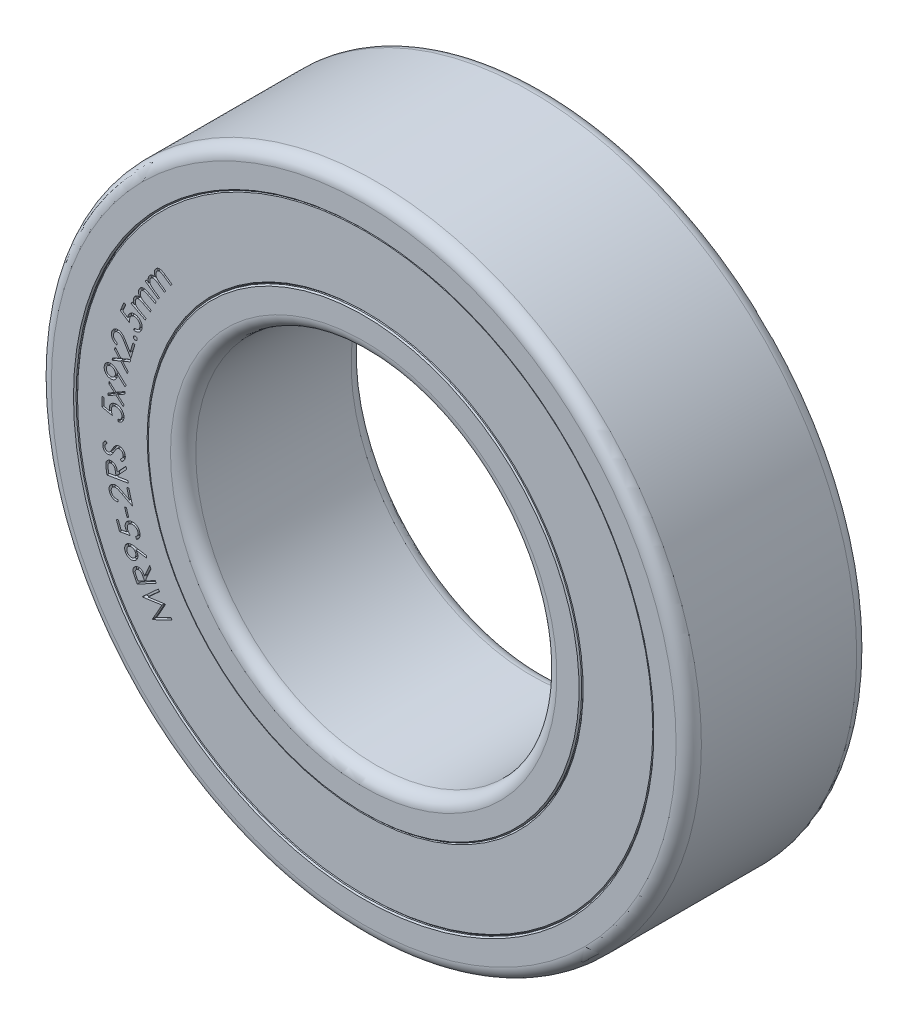
from build123d import *

# Parameters (mm, degrees)
SKETCH_R_INNER_BODY_W          = 2.5
SKETCH_R_INNER_BODY_H          = 0.5
FILLET_INNER_BODY_R            = 0.175
CHAMFER_INNER_BODY_SIZE        = 0.018
SKETCH_R_OUTER_BODY_W          = 2.5
SKETCH_R_OUTER_BODY_H          = 0.5
FILLET_OUTER_BODY_R            = 0.175
CHAMFER_OUTER_BODY_SIZE        = 0.018
SKETCH_R_SEAL_FACES_W          = 2.46
SKETCH_R_SEAL_FACES_H          = 1
CHAMFER_SEALS_SIZE             = 0.018
CUT_EXTRUDE_SEAL_LABEL_1_DEPTH = 0.05
CUT_EXTRUDE_SEAL_LABEL_2_DEPTH = 0.05


with BuildPart() as part:
    # Sketch R, INNER BODY → Revolve INNER BODY (revolve)
    with BuildSketch(Plane(origin=(0, 0, 0), x_dir=(0, 0, -1), z_dir=(1, 0, 0))):
        with Locations((0, 2.75)):
            Rectangle(SKETCH_R_INNER_BODY_W, SKETCH_R_INNER_BODY_H)
    revolve(axis=Axis((0, 0, 17.5), (0, 0, -1)))

    # Fillet INNER BODY
    fillet_inner_body_edges = [part.edges().sort_by_distance(p)[0] for p in [
        (0, -2.5, 1.25),
        (0, -2.5, -1.25),
    ]]
    fillet(fillet_inner_body_edges, radius=FILLET_INNER_BODY_R)

    # Chamfer INNER BODY
    chamfer_inner_body_edges = [part.edges().sort_by_distance(p)[0] for p in [
        (0, -3, -1.25),
        (0, -3, 1.25),
    ]]
    chamfer(chamfer_inner_body_edges, length=CHAMFER_INNER_BODY_SIZE)


with BuildPart() as body_2:
    # Sketch R, OUTER BODY → Revolve OUTER BODY (revolve)
    with BuildSketch(Plane(origin=(0, 0, 0), x_dir=(0, 0, -1), z_dir=(1, 0, 0))):
        with Locations((0, 4.25)):
            Rectangle(SKETCH_R_OUTER_BODY_W, SKETCH_R_OUTER_BODY_H)
    revolve(axis=Axis((0, 0, 17.5), (0, 0, -1)))

    # Fillet OUTER BODY
    fillet_outer_body_edges = [body_2.edges().sort_by_distance(p)[0] for p in [
        (0, -4.5, -1.25),
        (0, -4.5, 1.25),
    ]]
    fillet(fillet_outer_body_edges, radius=FILLET_OUTER_BODY_R)

    # Chamfer OUTER BODY
    chamfer_outer_body_edges = [body_2.edges().sort_by_distance(p)[0] for p in [
        (0, -4, 1.25),
        (0, -4, -1.25),
    ]]
    chamfer(chamfer_outer_body_edges, length=CHAMFER_OUTER_BODY_SIZE)


with BuildPart() as body_3:
    # Sketch R, SEAL FACES → Revolve SEALS (revolve)
    with BuildSketch(Plane(origin=(0, 0, 0), x_dir=(0, 0, -1), z_dir=(1, 0, 0))):
        with Locations((0, 3.5)):
            Rectangle(SKETCH_R_SEAL_FACES_W, SKETCH_R_SEAL_FACES_H)
    revolve(axis=Axis((0, 0, 17.5), (0, 0, -1)))

    # Chamfer SEALS
    chamfer_seals_edges = [body_3.edges().sort_by_distance(p)[0] for p in [
        (0, -3, -1.23),
        (0, -4, -1.23),
        (0, -4, 1.23),
        (0, -3, 1.23),
    ]]
    chamfer(chamfer_seals_edges, length=CHAMFER_SEALS_SIZE)

    # Sketch TEXT RADIUS 1 — MANUALLY ASSIGN TEXT AND FONT SIZE (FROM EQUATIONS) → Cut-Extrude SEAL LABEL 1 (cut)
    # profile 1 of 17: a face of its own
    with BuildSketch(Plane.XY.offset(1.23)):
        with BuildLine():
            Line((-3.044655517, 1.861451695), (-3.028609844, 1.884708907))
            Line((-3.028609844, 1.884708907), (-2.997179556, 1.863014195))
            add(Edge.make_bspline(
                [(-2.997179556, 1.863014195), (-2.998530733, 1.866899988), (-3.001121043, 1.87434935), (-3.003756142, 1.88541193), (-3.00535811, 1.895758417), (-3.005313744, 1.902432264), (-3.005292537, 1.905622369)],
                knots=[0, 0, 0, 0, 1.130541731, 2.167335052, 3.123984731, 4, 4, 4, 4], degree=3))
            add(Edge.make_bspline(
                [(-3.005292537, 1.905622369), (-3.004908101, 1.909708385), (-3.00415257, 1.917738628), (-3.001028069, 1.929328701), (-2.996589451, 1.940295242), (-2.992377315, 1.946904682), (-2.990268498, 1.950213715)],
                knots=[0, 0, 0, 0, 1.032373328, 2.028922121, 3.013174994, 4, 4, 4, 4], degree=3))
            add(Edge.make_bspline(
                [(-2.990268498, 1.950213715), (-2.988709473, 1.952352063), (-2.985613, 1.956599163), (-2.980223179, 1.962319328), (-2.974289403, 1.967401001), (-2.967893691, 1.971812194), (-2.961214125, 1.975525662), (-2.954405722, 1.978428846), (-2.94755741, 1.98050835), (-2.940538326, 1.981746951), (-2.933090557, 1.982096091), (-2.925017199, 1.981497925), (-2.916189932, 1.980037143), (-2.910148585, 1.978450816), (-2.906975229, 1.977617561)],
                knots=[0, 0, 0, 0, 1.007017668, 2.000097811, 2.984762118, 3.977226743, 4.953819895, 5.890412117, 6.790631374, 7.673585756, 8.597792949, 9.622342223, 10.751080926, 12, 12, 12, 12], degree=3))
            add(Edge.make_bspline(
                [(-2.906975229, 1.977617561), (-2.909011155, 1.981959665), (-2.912978263, 1.990420479), (-2.916904239, 2.003556048), (-2.919235024, 2.016483768), (-2.919646243, 2.029211672), (-2.918345202, 2.041554577), (-2.915338909, 2.053323949), (-2.910899473, 2.064566121), (-2.906570086, 2.071329114), (-2.904391094, 2.074732945)],
                knots=[0, 0, 0, 0, 1.125557522, 2.193206768, 3.210841859, 4.204594576, 5.175098859, 6.116961945, 7.052262268, 8, 8, 8, 8], degree=3))
            add(Edge.make_bspline(
                [(-2.904391094, 2.074732945), (-2.902173161, 2.077730858), (-2.897828119, 2.083603919), (-2.88995214, 2.091033121), (-2.88134641, 2.09713808), (-2.8719697, 2.10177058), (-2.862055492, 2.104993167), (-2.851724088, 2.10654707), (-2.841111427, 2.10653607), (-2.83209439, 2.105179116), (-2.824627801, 2.103163381), (-2.818554661, 2.101125479), (-2.81210994, 2.098436248), (-2.805277149, 2.095213528), (-2.798122241, 2.091303859), (-2.79054086, 2.086938926), (-2.782598124, 2.081923602), (-2.777237418, 2.078293991), (-2.77446321, 2.076415638)],
                knots=[0, 0, 0, 0, 1.207951003, 2.366436158, 3.495260411, 4.620148397, 5.746537535, 6.864305308, 7.995223301, 9.1782268, 9.810420825, 10.50307057, 11.255024188, 12.074892782, 12.953099132, 13.899556386, 14.913003618, 16, 16, 16, 16], degree=3))
            Line((-2.77446321, 2.076415638), (-2.675184363, 2.007906022))
            Line((-2.675184363, 2.007906022), (-2.691710806, 1.983987753))
            Line((-2.691710806, 1.983987753), (-2.790989652, 2.052497369))
            add(Edge.make_bspline(
                [(-2.790989652, 2.052497369), (-2.793348067, 2.054107881), (-2.79785848, 2.057187946), (-2.804428218, 2.061491073), (-2.810541629, 2.065219696), (-2.816197417, 2.068381214), (-2.821307372, 2.071149784), (-2.825973532, 2.073290117), (-2.83014808, 2.074980931), (-2.835049447, 2.076385368), (-2.840900685, 2.077397201), (-2.847864752, 2.077375284), (-2.854812286, 2.076265237), (-2.861648982, 2.074107511), (-2.868267522, 2.070846724), (-2.874397127, 2.066404847), (-2.880088734, 2.060935315), (-2.883277595, 2.056635144), (-2.88491994, 2.054420445)],
                knots=[0, 0, 0, 0, 1.267131748, 2.423358529, 3.484306612, 4.443457483, 5.298303801, 6.061867653, 6.720439788, 7.294266861, 8.321506198, 9.343657108, 10.36947269, 11.432057695, 12.513252663, 13.628119381, 14.778420707, 16, 16, 16, 16], degree=3))
            add(Edge.make_bspline(
                [(-2.88491994, 2.054420445), (-2.886721423, 2.051547714), (-2.890285302, 2.045864577), (-2.893889014, 2.03643238), (-2.896012423, 2.026540637), (-2.896577979, 2.016288616), (-2.895712099, 2.005996468), (-2.893244998, 1.995944087), (-2.889375279, 1.986258192), (-2.884881315, 1.978498436), (-2.880255306, 1.972378983), (-2.87588982, 1.967485783), (-2.870786669, 1.962216745), (-2.864705411, 1.956795041), (-2.857915953, 1.950944052), (-2.850144056, 1.944992857), (-2.841705597, 1.938557533), (-2.835658738, 1.934364205), (-2.832516094, 1.932184869)],
                knots=[0, 0, 0, 0, 1.0787433, 2.134082502, 3.198615297, 4.292372622, 5.394818358, 6.478915443, 7.579269619, 8.709491513, 9.325038894, 10.021830534, 10.798482285, 11.661825526, 12.617601244, 13.654780537, 14.781153919, 16, 16, 16, 16], degree=3))
            Line((-2.832516094, 1.932184869), (-2.761302152, 1.883086311))
            Line((-2.761302152, 1.883086311), (-2.777347825, 1.859829099))
            Line((-2.777347825, 1.859829099), (-2.870436767, 1.924071888))
            add(Edge.make_bspline(
                [(-2.870436767, 1.924071888), (-2.873072221, 1.925887882), (-2.878128108, 1.929371706), (-2.885515665, 1.934158954), (-2.892306276, 1.938404196), (-2.898562419, 1.941990916), (-2.904191577, 1.94507877), (-2.909250652, 1.947579855), (-2.913771451, 1.949457634), (-2.918974555, 1.95122556), (-2.925157815, 1.952446786), (-2.932481902, 1.952687312), (-2.939743279, 1.95177574), (-2.94686301, 1.949719123), (-2.953663752, 1.946551815), (-2.959947303, 1.942175506), (-2.965703483, 1.936757678), (-2.968915956, 1.932458108), (-2.97055696, 1.930261792)],
                knots=[0, 0, 0, 0, 1.33468449, 2.560474774, 3.67095347, 4.674012825, 5.567442362, 6.348324364, 7.026301596, 7.607503363, 8.638052648, 9.641112002, 10.65141626, 11.677315992, 12.720017726, 13.765126314, 14.85837644, 16, 16, 16, 16], degree=3))
            add(Edge.make_bspline(
                [(-2.97055696, 1.930261792), (-2.972272797, 1.927505983), (-2.975684814, 1.922025939), (-2.979164935, 1.912883795), (-2.98128453, 1.903204324), (-2.981906817, 1.893076825), (-2.981145253, 1.882858913), (-2.978908294, 1.872803932), (-2.97511438, 1.863128206), (-2.970791574, 1.855352238), (-2.966414896, 1.849228635), (-2.962373899, 1.844449688), (-2.957654413, 1.839497041), (-2.952208388, 1.834419525), (-2.946164003, 1.829050765), (-2.939353115, 1.823592944), (-2.931811394, 1.818024218), (-2.92653319, 1.814286896), (-2.923802152, 1.812353138)],
                knots=[0, 0, 0, 0, 1.086511866, 2.160575968, 3.260789972, 4.398448741, 5.550454939, 6.686367127, 7.839039032, 9.023910572, 9.659557347, 10.360530367, 11.120765546, 11.952352265, 12.856647758, 13.831263346, 14.877856711, 16, 16, 16, 16], degree=3))
            Line((-2.923802152, 1.812353138), (-2.846758883, 1.759228138))
            Line((-2.846758883, 1.759228138), (-2.862804556, 1.735970926))
            Line((-2.862804556, 1.735970926), (-3.044655517, 1.861451695))
        make_face()
    # profile 2 of 17: a face of its own
    with BuildSketch(Plane.XY.offset(1.23)):
        with BuildLine():
            Line((-3.240611366, 1.495417226), (-3.227630596, 1.520477322))
            Line((-3.227630596, 1.520477322), (-3.193736366, 1.502869149))
            add(Edge.make_bspline(
                [(-3.193736366, 1.502869149), (-3.195561103, 1.506567726), (-3.199055872, 1.513651306), (-3.203104051, 1.52427732), (-3.205960899, 1.534350986), (-3.206756097, 1.540975369), (-3.207137808, 1.544155207)],
                knots=[0, 0, 0, 0, 1.132593584, 2.169163625, 3.12116136, 4, 4, 4, 4], degree=3))
            add(Edge.make_bspline(
                [(-3.207137808, 1.544155207), (-3.207244637, 1.548245434), (-3.207455458, 1.556317215), (-3.205918049, 1.568216767), (-3.202811236, 1.579652748), (-3.199491574, 1.586744365), (-3.197822904, 1.590309053)],
                knots=[0, 0, 0, 0, 1.029200163, 2.031055683, 3.010285844, 4, 4, 4, 4], degree=3))
            add(Edge.make_bspline(
                [(-3.197822904, 1.590309053), (-3.196524326, 1.592619491), (-3.193952824, 1.597194726), (-3.189342844, 1.603562682), (-3.184086958, 1.609325996), (-3.178337956, 1.614547522), (-3.172202906, 1.619089815), (-3.165814511, 1.622835839), (-3.159271963, 1.625766413), (-3.152433841, 1.627864612), (-3.145067191, 1.629124687), (-3.136968338, 1.629574289), (-3.128038448, 1.629181957), (-3.121856177, 1.628360011), (-3.118616173, 1.627929246)],
                knots=[0, 0, 0, 0, 1.008536855, 1.997150319, 2.985292931, 3.973435542, 4.949733044, 5.886344845, 6.787762517, 7.673195242, 8.602355311, 9.626205343, 10.75594212, 12, 12, 12, 12], degree=3))
            add(Edge.make_bspline(
                [(-3.118616173, 1.627929246), (-3.1211906, 1.631975067), (-3.126194522, 1.639838946), (-3.131703257, 1.652396697), (-3.135667547, 1.664914869), (-3.13763714, 1.677513999), (-3.137900534, 1.689911719), (-3.136440995, 1.701984311), (-3.133361199, 1.713686702), (-3.129948935, 1.720962222), (-3.128231558, 1.724623957)],
                knots=[0, 0, 0, 0, 1.125124227, 2.186907923, 3.211103765, 4.202252113, 5.171927202, 6.115262128, 7.051420252, 8, 8, 8, 8], degree=3))
            add(Edge.make_bspline(
                [(-3.128231558, 1.724623957), (-3.126398903, 1.727867923), (-3.122812566, 1.734216068), (-3.115971256, 1.742605559), (-3.10815545, 1.749693111), (-3.09945429, 1.755503182), (-3.090017018, 1.759911713), (-3.079951161, 1.762754395), (-3.069416296, 1.764090763), (-3.060293419, 1.763820464), (-3.052624168, 1.762921082), (-3.046362057, 1.761517833), (-3.039630635, 1.759740205), (-3.032461694, 1.757354937), (-3.02484022, 1.754475523), (-3.016775305, 1.751016083), (-3.008247608, 1.747067725), (-3.002480368, 1.744115487), (-2.999505596, 1.742592707)],
                knots=[0, 0, 0, 0, 1.207128777, 2.362240532, 3.494117295, 4.618918706, 5.744208207, 6.85924085, 7.999112899, 9.17576355, 9.810996223, 10.501875492, 11.255451721, 12.069337882, 12.951728639, 13.898144647, 14.915852608, 16, 16, 16, 16], degree=3))
            Line((-2.999505596, 1.742592707), (-2.89241425, 1.687063861))
            Line((-2.89241425, 1.687063861), (-2.905815693, 1.661282611))
            Line((-2.905815693, 1.661282611), (-3.012907039, 1.716811457))
            add(Edge.make_bspline(
                [(-3.012907039, 1.716811457), (-3.015449783, 1.718095698), (-3.020319491, 1.720555198), (-3.027339648, 1.724055582), (-3.033927034, 1.726879083), (-3.039872778, 1.729456067), (-3.045342209, 1.73144303), (-3.050226098, 1.733016064), (-3.054594537, 1.734148857), (-3.059650976, 1.734935841), (-3.065588176, 1.735115728), (-3.072529333, 1.73440005), (-3.079249551, 1.732313264), (-3.08577762, 1.729326233), (-3.091898301, 1.725244361), (-3.097429095, 1.720098659), (-3.102372643, 1.713985298), (-3.104963481, 1.709304073), (-3.106296462, 1.706895592)],
                knots=[0, 0, 0, 0, 1.264466864, 2.421629101, 3.480584961, 4.444948308, 5.297257778, 6.062112668, 6.721985356, 7.297930244, 8.329929122, 9.350101639, 10.379723077, 11.437894788, 12.527862872, 13.628979692, 14.780114287, 16, 16, 16, 16], degree=3))
            add(Edge.make_bspline(
                [(-3.106296462, 1.706895592), (-3.107749612, 1.703811927), (-3.110614357, 1.697732778), (-3.112966988, 1.687904389), (-3.11390437, 1.677839562), (-3.113194013, 1.667592978), (-3.111098553, 1.657460473), (-3.10731289, 1.647813553), (-3.102325242, 1.638630322), (-3.096858788, 1.631506553), (-3.091487756, 1.626003893), (-3.086567088, 1.621647651), (-3.08075244, 1.617132946), (-3.074079875, 1.612493579), (-3.066591669, 1.607579222), (-3.058198171, 1.602571771), (-3.048910882, 1.597415402), (-3.042419942, 1.593964344), (-3.039048866, 1.592172034)],
                knots=[0, 0, 0, 0, 1.083317384, 2.135655997, 3.199174356, 4.292536093, 5.395075544, 6.481713895, 7.581165589, 8.714443229, 9.32812316, 10.028640085, 10.805965087, 11.671608373, 12.616669004, 13.658431082, 14.783903922, 16, 16, 16, 16], degree=3))
            Line((-3.039048866, 1.592172034), (-2.962245981, 1.55238838))
            Line((-2.962245981, 1.55238838), (-2.97522675, 1.527328284))
            Line((-2.97522675, 1.527328284), (-3.075647423, 1.579371553))
            add(Edge.make_bspline(
                [(-3.075647423, 1.579371553), (-3.078486142, 1.580825578), (-3.083940462, 1.583619344), (-3.091864816, 1.58744445), (-3.099132202, 1.590848241), (-3.105787983, 1.593672787), (-3.111807002, 1.595965252), (-3.117156725, 1.59777715), (-3.121854127, 1.59915839), (-3.127243649, 1.600192311), (-3.133504238, 1.600573919), (-3.140792585, 1.600011839), (-3.147873137, 1.598166419), (-3.154650025, 1.595207596), (-3.16103374, 1.591246543), (-3.166689783, 1.586122589), (-3.171738794, 1.580028105), (-3.174357181, 1.575352525), (-3.17570752, 1.572941265)],
                knots=[0, 0, 0, 0, 1.330427758, 2.556286931, 3.670449809, 4.67773455, 5.571674555, 6.356509549, 7.033739286, 7.612265661, 8.642275129, 9.640192168, 10.649519909, 11.67874944, 12.715112045, 13.768549429, 14.849210551, 16, 16, 16, 16], degree=3))
            add(Edge.make_bspline(
                [(-3.17570752, 1.572941265), (-3.177068657, 1.569993302), (-3.179774606, 1.564132735), (-3.182084481, 1.554630636), (-3.183002247, 1.544768178), (-3.182355452, 1.534648852), (-3.180365783, 1.524593296), (-3.176807791, 1.514931761), (-3.171900954, 1.505769805), (-3.166608934, 1.498626871), (-3.161494084, 1.493103024), (-3.15685779, 1.488887066), (-3.151554461, 1.484536693), (-3.145511322, 1.480189661), (-3.138836383, 1.475638231), (-3.131383905, 1.471123519), (-3.123246901, 1.466476209), (-3.117543103, 1.463450339), (-3.114589731, 1.461883572)],
                knots=[0, 0, 0, 0, 1.086964324, 2.160891624, 3.260738449, 4.398258598, 5.549958486, 6.687161081, 7.838508113, 9.025134917, 9.657483793, 10.361231094, 11.125206012, 11.957104511, 12.857217981, 13.834430782, 14.87868914, 16, 16, 16, 16], degree=3))
            Line((-3.114589731, 1.461883572), (-3.03147675, 1.41879463))
            Line((-3.03147675, 1.41879463), (-3.04445752, 1.393734534))
            Line((-3.04445752, 1.393734534), (-3.240611366, 1.495417226))
        make_face()
    # profile 3 of 17: a face of its own
    with BuildSketch(Plane.XY.offset(1.23)):
        with BuildLine():
            Line((-3.340196174, 1.454517869), (-3.31417454, 1.443520273))
            Line((-3.31417454, 1.443520273), (-3.355340405, 1.346104407))
            Line((-3.355340405, 1.346104407), (-3.286470213, 1.301032292))
            add(Edge.make_bspline(
                [(-3.286470213, 1.301032292), (-3.286055238, 1.304265229), (-3.285251935, 1.310523494), (-3.283339105, 1.319481031), (-3.28115566, 1.327785177), (-3.279108429, 1.332920153), (-3.278116847, 1.335407292)],
                knots=[0, 0, 0, 0, 1.101595844, 2.132450601, 3.095447389, 4, 4, 4, 4], degree=3))
            add(Edge.make_bspline(
                [(-3.278116847, 1.335407292), (-3.276750163, 1.338420198), (-3.274065628, 1.344338356), (-3.26915047, 1.352598019), (-3.263672604, 1.36015507), (-3.257591082, 1.366982485), (-3.250885306, 1.37303563), (-3.243525429, 1.378295375), (-3.235603452, 1.382863213), (-3.227124609, 1.386649554), (-3.218297241, 1.389544951), (-3.209276909, 1.391666265), (-3.200097502, 1.392642932), (-3.190823061, 1.392763386), (-3.181411976, 1.392000959), (-3.171931962, 1.390137535), (-3.162283289, 1.387451315), (-3.155980739, 1.384946169), (-3.152756271, 1.383664503)],
                knots=[0, 0, 0, 0, 1.053813289, 2.069972532, 3.057155455, 4.024819656, 4.978715596, 5.930236768, 6.902733542, 7.888759545, 8.884146603, 9.859928388, 10.836461868, 11.819796917, 12.812908426, 13.839722996, 14.894773428, 16, 16, 16, 16], degree=3))
            add(Edge.make_bspline(
                [(-3.152756271, 1.383664503), (-3.15053653, 1.382696289), (-3.146146867, 1.38078159), (-3.139888818, 1.377344537), (-3.133878224, 1.373724591), (-3.128192721, 1.369708169), (-3.122775409, 1.365415897), (-3.117736832, 1.360692284), (-3.112956567, 1.355697133), (-3.108532479, 1.350364926), (-3.104495511, 1.344802664), (-3.100745119, 1.339140269), (-3.097625275, 1.333245405), (-3.094792594, 1.327279678), (-3.092551722, 1.321147017), (-3.090647776, 1.314895393), (-3.089213966, 1.30850845), (-3.088264342, 1.301977702), (-3.08770914, 1.295374863), (-3.087646865, 1.288705052), (-3.088099786, 1.282004344), (-3.088901175, 1.275225846), (-3.090348599, 1.268426233), (-3.09203121, 1.261531317), (-3.094375495, 1.254655723), (-3.096186151, 1.250103048), (-3.097107232, 1.2477871)],
                knots=[0, 0, 0, 0, 1.059050799, 2.094332645, 3.121008259, 4.127698099, 5.13789213, 6.142595935, 7.14691736, 8.161398887, 9.171174578, 10.153336995, 11.129851598, 12.086657475, 13.040689355, 13.983462154, 14.944593867, 15.90152017, 16.86886616, 17.841794753, 18.816616512, 19.805909836, 20.825226211, 21.856232549, 22.909464344, 24, 24, 24, 24], degree=3))
            add(Edge.make_bspline(
                [(-3.097107232, 1.2477871), (-3.09832053, 1.245078259), (-3.100697554, 1.239771255), (-3.105040309, 1.232344656), (-3.1097631, 1.22544394), (-3.115081851, 1.219186219), (-3.120865519, 1.213499699), (-3.12716855, 1.208444388), (-3.133901818, 1.203881326), (-3.141167938, 1.200091893), (-3.148704114, 1.196906597), (-3.156427719, 1.194437035), (-3.164266341, 1.192656405), (-3.172262307, 1.191737976), (-3.180384772, 1.191392457), (-3.188647842, 1.191920209), (-3.197037204, 1.193093535), (-3.202585779, 1.194453152), (-3.205400501, 1.195142869)],
                knots=[0, 0, 0, 0, 1.07719877, 2.110385922, 3.11939418, 4.110488606, 5.087925461, 6.060477001, 7.041076259, 8.036885326, 9.031311619, 10.009100357, 10.978080988, 11.94539433, 12.928176984, 13.926533831, 14.948156485, 16, 16, 16, 16], degree=3))
            Line((-3.205400501, 1.195142869), (-3.193561559, 1.223207773))
            add(Edge.make_bspline(
                [(-3.193561559, 1.223207773), (-3.190805091, 1.222702568), (-3.185480618, 1.2217267), (-3.17763743, 1.221358865), (-3.170289879, 1.221636926), (-3.163401744, 1.222933088), (-3.156877695, 1.225060241), (-3.150652466, 1.228065948), (-3.144599356, 1.231795686), (-3.138889582, 1.236370161), (-3.133540424, 1.241524709), (-3.128951321, 1.247324794), (-3.124927331, 1.253514023), (-3.122893908, 1.257974209), (-3.121866847, 1.260227003)],
                knots=[0, 0, 0, 0, 1.144907757, 2.211537414, 3.204105396, 4.145763013, 5.068118777, 6.002620837, 6.966610574, 7.969773334, 8.98946137, 9.997729996, 10.98867359, 12, 12, 12, 12], degree=3))
            add(Edge.make_bspline(
                [(-3.121866847, 1.260227003), (-3.120997117, 1.262454523), (-3.119276663, 1.266860878), (-3.117566579, 1.273681451), (-3.116497777, 1.280521567), (-3.11628248, 1.28741802), (-3.116766282, 1.294343516), (-3.117961476, 1.301300618), (-3.119996547, 1.308248578), (-3.122680326, 1.315169945), (-3.125991207, 1.32188464), (-3.129934542, 1.328209694), (-3.13447712, 1.334035945), (-3.139508003, 1.339514801), (-3.145266228, 1.344340144), (-3.151511052, 1.348769266), (-3.158310217, 1.352774126), (-3.163190119, 1.354964263), (-3.165676944, 1.356080369)],
                knots=[0, 0, 0, 0, 0.977230504, 1.933102943, 2.869390409, 3.804027269, 4.748560035, 5.704959077, 6.68524188, 7.704702332, 8.738029181, 9.742897682, 10.747532326, 11.756235008, 12.779146866, 13.813545143, 14.885770732, 16, 16, 16, 16], degree=3))
            add(Edge.make_bspline(
                [(-3.165676944, 1.356080369), (-3.167946436, 1.356981254), (-3.172403528, 1.358750517), (-3.179221602, 1.360686524), (-3.185948792, 1.361874294), (-3.192589187, 1.362459316), (-3.199117833, 1.362262851), (-3.205559482, 1.361411353), (-3.211914117, 1.359912742), (-3.218120147, 1.357672378), (-3.224124609, 1.35488385), (-3.229749743, 1.3514354), (-3.234953287, 1.347365874), (-3.239781468, 1.342709914), (-3.244242122, 1.33744981), (-3.248313363, 1.331610655), (-3.252042828, 1.325197331), (-3.254063361, 1.320585797), (-3.255100021, 1.318219792)],
                knots=[0, 0, 0, 0, 1.07102106, 2.103395582, 3.103492668, 4.064905267, 5.023420098, 5.96329276, 6.912084451, 7.882417172, 8.853705023, 9.812542261, 10.770855533, 11.746905016, 12.750896321, 13.792213834, 14.86726753, 16, 16, 16, 16], degree=3))
            add(Edge.make_bspline(
                [(-3.255100021, 1.318219792), (-3.255934041, 1.316128018), (-3.257643971, 1.311839412), (-3.259647125, 1.304990571), (-3.261378874, 1.297667269), (-3.26283741, 1.289829198), (-3.263882511, 1.281458898), (-3.264675405, 1.272580203), (-3.265079375, 1.263195621), (-3.26511687, 1.256781817), (-3.265136078, 1.253496234)],
                knots=[0, 0, 0, 0, 0.819509612, 1.680178214, 2.594783454, 3.558966246, 4.581233324, 5.664833433, 6.803770528, 8, 8, 8, 8], degree=3))
            Line((-3.265136078, 1.253496234), (-3.390196174, 1.336128446))
            Line((-3.390196174, 1.336128446), (-3.340196174, 1.454517869))
        make_face()
    # profile 4 of 17: a face of its own
    with BuildSketch(Plane.XY.offset(1.23)):
        with BuildLine():
            add(Edge.make_bspline(
                [(-3.205654182, 1.116305702), (-3.205034932, 1.117859947), (-3.203823418, 1.120900706), (-3.200950264, 1.124901072), (-3.197379751, 1.128240356), (-3.193145089, 1.130790305), (-3.188565733, 1.132637077), (-3.183711369, 1.133401585), (-3.178747412, 1.133272767), (-3.17555296, 1.132344256), (-3.173923413, 1.131870606)],
                knots=[0, 0, 0, 0, 1.018671244, 1.992950926, 2.979825135, 3.984960337, 4.99603523, 5.975601414, 6.96731772, 8, 8, 8, 8], degree=3))
            add(Edge.make_bspline(
                [(-3.173923413, 1.131870606), (-3.172372918, 1.131246558), (-3.169324257, 1.130019523), (-3.165270566, 1.127208181), (-3.161980211, 1.123547863), (-3.159389519, 1.119320871), (-3.15748887, 1.114745688), (-3.15662824, 1.109934461), (-3.156781404, 1.105022217), (-3.157706248, 1.101869131), (-3.15817822, 1.100260029)],
                knots=[0, 0, 0, 0, 1.02007891, 2.005731223, 2.985655838, 4.00904038, 5.026024339, 5.996946275, 6.977789569, 8, 8, 8, 8], degree=3))
            add(Edge.make_bspline(
                [(-3.15817822, 1.100260029), (-3.158769415, 1.098701186), (-3.159922984, 1.095659492), (-3.162848198, 1.091723575), (-3.166396943, 1.088364452), (-3.170692469, 1.085837098), (-3.175309462, 1.083997275), (-3.180160647, 1.083225172), (-3.185085997, 1.083353041), (-3.188239552, 1.084281437), (-3.189848893, 1.084755221)],
                knots=[0, 0, 0, 0, 1.015914227, 1.982304378, 2.971298707, 3.989061061, 5.013742541, 5.995413145, 6.977007173, 8, 8, 8, 8], degree=3))
            add(Edge.make_bspline(
                [(-3.189848893, 1.084755221), (-3.191421402, 1.085375517), (-3.194496851, 1.086588668), (-3.198565578, 1.089435647), (-3.201884746, 1.093052511), (-3.204564977, 1.097243092), (-3.206236438, 1.10189358), (-3.207158577, 1.106687294), (-3.206979029, 1.111578004), (-3.206099715, 1.114715823), (-3.205654182, 1.116305702)],
                knots=[0, 0, 0, 0, 1.031674157, 2.017708131, 3.006328727, 4.019711813, 5.039670341, 6.010968233, 6.992191325, 8, 8, 8, 8], degree=3))
        make_face()
    # profile 5 of 17: a face of its own
    with BuildSketch(Plane.XY.offset(1.23)):
        with BuildLine():
            Line((-3.43150228, 0.925281872), (-3.439495068, 0.897757834))
            add(Edge.make_bspline(
                [(-3.439495068, 0.897757834), (-3.442922946, 0.898941788), (-3.449647913, 0.901264522), (-3.459190979, 0.905681584), (-3.467995457, 0.910803244), (-3.476097346, 0.916585716), (-3.483463488, 0.923068127), (-3.490174226, 0.930152398), (-3.496095935, 0.937996351), (-3.501278391, 0.94641043), (-3.505662966, 0.955230852), (-3.509016873, 0.964311677), (-3.511559019, 0.973506666), (-3.512962982, 0.982887049), (-3.513459802, 0.992429492), (-3.512952344, 1.002108984), (-3.511538041, 1.011959396), (-3.509832032, 1.018444813), (-3.508966222, 1.021736199)],
                knots=[0, 0, 0, 0, 1.099147039, 2.156356573, 3.182538877, 4.183807788, 5.169497214, 6.153538267, 7.13757932, 8.143957248, 9.146349431, 10.118906422, 11.075184919, 12.033910303, 12.988798803, 13.967953449, 14.96872477, 16, 16, 16, 16], degree=3))
            add(Edge.make_bspline(
                [(-3.508966222, 1.021736199), (-3.507938317, 1.024940608), (-3.50592898, 1.031204551), (-3.50205606, 1.040115052), (-3.497494997, 1.04827938), (-3.492292686, 1.055779786), (-3.486357238, 1.062496906), (-3.479873635, 1.068658047), (-3.472580345, 1.073914741), (-3.464807399, 1.078548062), (-3.45664649, 1.082320269), (-3.448356839, 1.085385463), (-3.439979716, 1.087543885), (-3.431529903, 1.088900262), (-3.42300729, 1.089302676), (-3.414436776, 1.088870426), (-3.4057935, 1.087632852), (-3.400119786, 1.086135871), (-3.397247472, 1.085378026)],
                knots=[0, 0, 0, 0, 1.124550783, 2.198259365, 3.241610281, 4.24671201, 5.243367073, 6.233634197, 7.230199257, 8.242060739, 9.25471973, 10.231397169, 11.192988093, 12.142067885, 13.087502, 14.039624894, 15.007561334, 16, 16, 16, 16], degree=3))
            add(Edge.make_bspline(
                [(-3.397247472, 1.085378026), (-3.393282289, 1.084074851), (-3.385414807, 1.081489167), (-3.37431474, 1.075861664), (-3.364052032, 1.068850736), (-3.35616352, 1.06182757), (-3.350008796, 1.05533871), (-3.345124667, 1.049577754), (-3.339970301, 1.042996068), (-3.334460037, 1.035663968), (-3.328812593, 1.027409339), (-3.322772594, 1.018406357), (-3.31653724, 1.008525181), (-3.312341599, 1.001630133), (-3.310168145, 0.998058315)],
                knots=[0, 0, 0, 0, 1.185897681, 2.352988246, 3.525670943, 4.712444391, 5.349246168, 6.068640821, 6.859761563, 7.72700136, 8.676946607, 9.70416959, 10.810698665, 12, 12, 12, 12], degree=3))
            Line((-3.310168145, 0.998058315), (-3.253797953, 0.904128026))
            Line((-3.253797953, 0.904128026), (-3.215276318, 1.036760238))
            Line((-3.215276318, 1.036760238), (-3.187511895, 1.028707353))
            Line((-3.187511895, 1.028707353), (-3.244182568, 0.833575142))
            Line((-3.244182568, 0.833575142), (-3.330901318, 0.977805911))
            add(Edge.make_bspline(
                [(-3.330901318, 0.977805911), (-3.332995744, 0.981316882), (-3.337021093, 0.98806474), (-3.342948026, 0.997676262), (-3.348567636, 1.006352277), (-3.35376903, 1.014164827), (-3.358630382, 1.021084344), (-3.363128626, 1.027105393), (-3.367259466, 1.032235623), (-3.37225823, 1.037803615), (-3.378519728, 1.043748049), (-3.386695953, 1.049516356), (-3.395414116, 1.054221925), (-3.401637757, 1.056280537), (-3.404759491, 1.057313122)],
                knots=[0, 0, 0, 0, 1.322679945, 2.542104766, 3.653094673, 4.666901884, 5.578547963, 6.388682746, 7.09823503, 7.708592962, 8.809079288, 9.88269098, 10.937972934, 12, 12, 12, 12], degree=3))
            add(Edge.make_bspline(
                [(-3.404759491, 1.057313122), (-3.406754059, 1.057833463), (-3.410707032, 1.058864711), (-3.416732232, 1.059704218), (-3.422713501, 1.059871023), (-3.428641018, 1.059474636), (-3.434514437, 1.058353927), (-3.440349706, 1.056668197), (-3.446160886, 1.054382188), (-3.451796213, 1.051418981), (-3.457259369, 1.048084526), (-3.462180071, 1.044105207), (-3.466734708, 1.039851992), (-3.470776973, 1.035131598), (-3.474326271, 1.030008173), (-3.47741123, 1.024470043), (-3.480083525, 1.018553765), (-3.481385298, 1.014360209), (-3.482043145, 1.012241007)],
                knots=[0, 0, 0, 0, 0.993748128, 1.969480054, 2.926564164, 3.87595876, 4.82927933, 5.8048677, 6.80255445, 7.835464998, 8.873065697, 9.884185998, 10.882153484, 11.875760658, 12.875597698, 13.883619588, 14.930492963, 16, 16, 16, 16], degree=3))
            add(Edge.make_bspline(
                [(-3.482043145, 1.012241007), (-3.48264771, 1.009966805), (-3.483830604, 1.005517087), (-3.484838801, 0.998772521), (-3.48524884, 0.992167618), (-3.484812842, 0.985674636), (-3.483991657, 0.979291954), (-3.482300314, 0.973042957), (-3.48003853, 0.966910729), (-3.477065618, 0.960968903), (-3.473547091, 0.955227448), (-3.46929846, 0.949895559), (-3.464510408, 0.94484744), (-3.459112747, 0.940182522), (-3.453081981, 0.935886955), (-3.446485746, 0.931919604), (-3.43922478, 0.928377952), (-3.434120146, 0.926331419), (-3.43150228, 0.925281872)],
                knots=[0, 0, 0, 0, 1.008055897, 1.972367849, 2.918382342, 3.838674043, 4.758003682, 5.67238687, 6.607109008, 7.555692399, 8.516019573, 9.488365851, 10.472359667, 11.495085833, 12.541265366, 13.642860846, 14.791162281, 16, 16, 16, 16], degree=3))
        make_face()
    # profile 6 of 17: a face of its own
    with BuildSketch(Plane.XY.offset(1.23)):
        Polygon((-3.503973393, 0.682919686), (-3.496220989, 0.716032667), (-3.403432527, 0.754193725), (-3.469598393, 0.829614398), (-3.461785893, 0.862787475), (-3.377110412, 0.765551898), (-3.245079162, 0.821741802), (-3.252951758, 0.788208148), (-3.358480604, 0.743676898), (-3.2835407, 0.65785959), (-3.291233008, 0.624926898), (-3.38480272, 0.732619206), align=None)
    # profile 7 of 17: a face of its own
    with BuildSketch(Plane.XY.offset(1.23)):
        with BuildLine():
            Line((-3.306475319, 0.476548719), (-3.325946473, 0.454673719))
            Line((-3.325946473, 0.454673719), (-3.434540223, 0.553171315))
            add(Edge.make_bspline(
                [(-3.434540223, 0.553171315), (-3.434165866, 0.550410597), (-3.43343815, 0.545044013), (-3.432933142, 0.537113393), (-3.433079949, 0.529528778), (-3.433697337, 0.524622102), (-3.433999358, 0.522221796)],
                knots=[0, 0, 0, 0, 1.075717044, 2.091095723, 3.066179731, 4, 4, 4, 4], degree=3))
            add(Edge.make_bspline(
                [(-3.433999358, 0.522221796), (-3.434525267, 0.519364588), (-3.435563143, 0.513725922), (-3.438060231, 0.505568174), (-3.441284568, 0.497864468), (-3.445329393, 0.490648506), (-3.449976446, 0.483818433), (-3.45552959, 0.477553137), (-3.46174845, 0.471704948), (-3.468606526, 0.466320954), (-3.475986477, 0.461636468), (-3.483673804, 0.457667292), (-3.491635678, 0.454597445), (-3.499857547, 0.452373125), (-3.508328904, 0.450930079), (-3.517040313, 0.450248039), (-3.526018227, 0.450508086), (-3.532021125, 0.451276973), (-3.535081088, 0.451668912)],
                knots=[0, 0, 0, 0, 1.014551301, 2.002204942, 2.974708779, 3.927281154, 4.88845712, 5.855832975, 6.846261208, 7.868511372, 8.897736499, 9.896442259, 10.887043645, 11.873679636, 12.868008861, 13.885959649, 14.922372869, 16, 16, 16, 16], degree=3))
            add(Edge.make_bspline(
                [(-3.535081088, 0.451668912), (-3.539213622, 0.452444151), (-3.54733563, 0.453967794), (-3.558917289, 0.458045904), (-3.569585432, 0.463600441), (-3.579410975, 0.470367174), (-3.588178342, 0.478442628), (-3.595645059, 0.487756605), (-3.602038783, 0.498037148), (-3.607014599, 0.509320055), (-3.610691163, 0.521172626), (-3.612742495, 0.533355109), (-3.61322654, 0.545693013), (-3.612254334, 0.553858756), (-3.611763781, 0.557979008)],
                knots=[0, 0, 0, 0, 1.035128347, 2.034422629, 3.01260307, 3.991792143, 4.966527923, 5.938810086, 6.925277816, 7.941862, 8.969439697, 9.975867242, 10.97866766, 12, 12, 12, 12], degree=3))
            add(Edge.make_bspline(
                [(-3.611763781, 0.557979008), (-3.611011347, 0.56197328), (-3.60952124, 0.569883464), (-3.605389905, 0.581183298), (-3.599955851, 0.591793613), (-3.59315255, 0.601602386), (-3.585118697, 0.610423011), (-3.576004077, 0.618066016), (-3.565819421, 0.624310255), (-3.554792547, 0.629188725), (-3.543230776, 0.632728506), (-3.531377874, 0.634734348), (-3.519404526, 0.635212275), (-3.511477358, 0.634285638), (-3.507496954, 0.633820354)],
                knots=[0, 0, 0, 0, 1.018129204, 2.016284187, 3.005124489, 4.001760518, 5.001267956, 5.989495229, 6.975433056, 7.987679982, 9.006602488, 10.000396924, 10.995955625, 12, 12, 12, 12], degree=3))
            add(Edge.make_bspline(
                [(-3.507496954, 0.633820354), (-3.50441582, 0.63326718), (-3.498150955, 0.632142412), (-3.488891205, 0.629140217), (-3.479536965, 0.625356339), (-3.471749911, 0.621415567), (-3.465427602, 0.61766412), (-3.460374897, 0.614519781), (-3.455192331, 0.610840049), (-3.449754923, 0.606869116), (-3.444143385, 0.602434641), (-3.438319455, 0.597641603), (-3.432307788, 0.59241093), (-3.428301099, 0.588718297), (-3.426246954, 0.586825162)],
                knots=[0, 0, 0, 0, 1.181507829, 2.402358329, 3.668672067, 4.99211822, 5.694357622, 6.446079835, 7.23972469, 8.094996756, 8.989807845, 9.941422319, 10.944610393, 12, 12, 12, 12], degree=3))
            Line((-3.426246954, 0.586825162), (-3.306475319, 0.476548719))
        make_face()
        with BuildLine():
            add(Edge.make_bspline(
                [(-3.458879165, 0.533039104), (-3.458589025, 0.535158837), (-3.458016011, 0.539345202), (-3.458029674, 0.545628296), (-3.4584424, 0.55177623), (-3.459639421, 0.557742346), (-3.461300092, 0.563580559), (-3.46366933, 0.569230489), (-3.46664672, 0.574732569), (-3.470154807, 0.580031366), (-3.474143631, 0.584978318), (-3.478507549, 0.58944189), (-3.483116061, 0.59346721), (-3.488167201, 0.596810567), (-3.4934707, 0.599745604), (-3.499143839, 0.60206747), (-3.5051163, 0.603907491), (-3.509250057, 0.604655537), (-3.511343108, 0.605034296)],
                knots=[0, 0, 0, 0, 1.035251471, 2.044569754, 3.037472204, 4.015754784, 4.986208272, 5.97383245, 6.976832633, 8.013084303, 9.048244799, 10.05021159, 11.034396889, 12.006062686, 12.978842474, 13.966466652, 14.970358453, 16, 16, 16, 16], degree=3))
            add(Edge.make_bspline(
                [(-3.511343108, 0.605034296), (-3.513463245, 0.605289333), (-3.517632899, 0.605790912), (-3.52387598, 0.605937976), (-3.529949011, 0.605360261), (-3.535919963, 0.604299884), (-3.541721475, 0.602554277), (-3.547369052, 0.600173979), (-3.552856246, 0.597206623), (-3.5581568, 0.593700007), (-3.563095317, 0.589704064), (-3.567591403, 0.585364514), (-3.571506089, 0.580659435), (-3.574880729, 0.575631426), (-3.577806324, 0.57032076), (-3.580143457, 0.564633492), (-3.581969314, 0.558615395), (-3.582718554, 0.554442713), (-3.583097915, 0.552329969)],
                knots=[0, 0, 0, 0, 1.034705745, 2.034945541, 3.019463964, 3.986885903, 4.969871105, 5.949012754, 6.952498792, 7.989252425, 9.024914355, 10.027366501, 11.013176724, 11.985313198, 12.958564203, 13.946666789, 14.960340763, 16, 16, 16, 16], degree=3))
            add(Edge.make_bspline(
                [(-3.583097915, 0.552329969), (-3.58335296, 0.550209827), (-3.583854554, 0.546040166), (-3.58400151, 0.539797143), (-3.583424194, 0.533723898), (-3.582362346, 0.527753733), (-3.580622285, 0.521949253), (-3.578224824, 0.516321521), (-3.57534339, 0.510799099), (-3.571818107, 0.505519748), (-3.567831603, 0.500573973), (-3.563489485, 0.49610398), (-3.558840414, 0.492145874), (-3.553810592, 0.488800629), (-3.548519971, 0.485849684), (-3.542818426, 0.483618515), (-3.53686274, 0.481757215), (-3.532727682, 0.481012387), (-3.530633973, 0.480635258)],
                knots=[0, 0, 0, 0, 1.036941676, 2.039342925, 3.025988828, 3.995501302, 4.980610671, 5.96186818, 6.962946251, 8.001940241, 9.039840169, 10.044458548, 11.02494387, 11.999181067, 12.974535204, 13.961085143, 14.967633627, 16, 16, 16, 16], degree=3))
            add(Edge.make_bspline(
                [(-3.530633973, 0.480635258), (-3.52851426, 0.480345113), (-3.524347802, 0.479774813), (-3.518104815, 0.47978436), (-3.511997047, 0.480202669), (-3.506052457, 0.481398607), (-3.500224784, 0.483038574), (-3.494627111, 0.485454343), (-3.489102413, 0.488327764), (-3.483824888, 0.4918563), (-3.478874204, 0.495838166), (-3.474412039, 0.500204065), (-3.470384751, 0.504811406), (-3.467047798, 0.509865268), (-3.464092707, 0.515152351), (-3.461862665, 0.520854857), (-3.46000106, 0.526810284), (-3.459256274, 0.530945377), (-3.458879165, 0.533039104)],
                knots=[0, 0, 0, 0, 1.037623589, 2.039528251, 3.025009084, 4.005533247, 4.978210379, 5.959120423, 6.959844011, 7.998470091, 9.036002497, 10.040265139, 11.026705545, 12.000597764, 12.975606526, 13.961807126, 14.96799919, 16, 16, 16, 16], degree=3))
        make_face(mode=Mode.SUBTRACT)
    # profile 8 of 17: a face of its own
    with BuildSketch(Plane.XY.offset(1.23)):
        Polygon((-3.562015091, 0.228240613), (-3.55858961, 0.262014652), (-3.471690572, 0.311654075), (-3.54687086, 0.377759844), (-3.543445379, 0.411533883), (-3.447111245, 0.32625744), (-3.323854033, 0.398793498), (-3.327279514, 0.364598786), (-3.425897302, 0.307026671), (-3.340801148, 0.231786286), (-3.344166533, 0.198252633), (-3.450536725, 0.29266369), align=None)
    # profile 9 of 17: a face of its own
    with BuildSketch(Plane.XY.offset(1.23)):
        with BuildLine():
            Line((-3.642588029, 0.181896913), (-3.614162549, 0.181115663))
            Line((-3.614162549, 0.181115663), (-3.61710726, 0.074805567))
            Line((-3.61710726, 0.074805567), (-3.536217837, 0.057738259))
            add(Edge.make_bspline(
                [(-3.536217837, 0.057738259), (-3.537003012, 0.060914032), (-3.538524337, 0.067067293), (-3.540015963, 0.076166561), (-3.540851795, 0.08476497), (-3.540847375, 0.090328757), (-3.540845241, 0.093014702)],
                knots=[0, 0, 0, 0, 1.099484473, 2.130320441, 3.097403469, 4, 4, 4, 4], degree=3))
            add(Edge.make_bspline(
                [(-3.540845241, 0.093014702), (-3.540662845, 0.096345257), (-3.540306223, 0.10285718), (-3.538797163, 0.11238702), (-3.536379848, 0.121442459), (-3.533133807, 0.130036196), (-3.52910326, 0.138189773), (-3.524099928, 0.145766136), (-3.5183922, 0.152991191), (-3.511790103, 0.159580211), (-3.504619807, 0.165598875), (-3.496883434, 0.170795405), (-3.48867973, 0.175131426), (-3.480041326, 0.178631639), (-3.470962125, 0.181291806), (-3.461421207, 0.183075551), (-3.45142356, 0.184064305), (-3.444613372, 0.18402188), (-3.441145722, 0.184000278)],
                knots=[0, 0, 0, 0, 1.057669383, 2.067961672, 3.054510465, 4.025898927, 4.977971059, 5.933324929, 6.900985319, 7.894082547, 8.886752694, 9.866729898, 10.844644423, 11.825301359, 12.818703533, 13.840720001, 14.900525476, 16, 16, 16, 16], degree=3))
            add(Edge.make_bspline(
                [(-3.441145722, 0.184000278), (-3.438719508, 0.183891144), (-3.433914617, 0.183675012), (-3.426790883, 0.182807277), (-3.419825189, 0.181556077), (-3.413017003, 0.179876813), (-3.406408537, 0.177747903), (-3.399933651, 0.175315201), (-3.39367777, 0.172321796), (-3.387574918, 0.169006325), (-3.381779522, 0.165245969), (-3.376202718, 0.161334313), (-3.371121402, 0.156962364), (-3.366334514, 0.152396758), (-3.361939951, 0.147511538), (-3.357903464, 0.142330651), (-3.354226209, 0.136848606), (-3.350939147, 0.131072806), (-3.347972346, 0.125094385), (-3.345521519, 0.118844375), (-3.343414787, 0.11242924), (-3.341692585, 0.105772992), (-3.340553688, 0.098888422), (-3.339680787, 0.09181355), (-3.339254232, 0.084526219), (-3.339313, 0.079593582), (-3.339342837, 0.077089221)],
                knots=[0, 0, 0, 0, 1.056856092, 2.093005315, 3.120939918, 4.136072287, 5.142629734, 6.141794981, 7.144265021, 8.158910418, 9.162744776, 10.150044396, 11.121389039, 12.077268187, 13.02808288, 13.978697634, 14.933980016, 15.898726948, 16.869758431, 17.836434347, 18.81809596, 19.80785691, 20.825682142, 21.85317284, 22.910028932, 24, 24, 24, 24], degree=3))
            add(Edge.make_bspline(
                [(-3.339342837, 0.077089221), (-3.339494862, 0.074120319), (-3.339794, 0.068278445), (-3.3410665, 0.059707073), (-3.343046931, 0.051523), (-3.345709519, 0.043721633), (-3.349011556, 0.036277108), (-3.353076702, 0.029237023), (-3.357756851, 0.022519742), (-3.363186599, 0.016310611), (-3.369083123, 0.010564173), (-3.375437448, 0.005440431), (-3.382124794, 0.000888982), (-3.389253119, -0.002973459), (-3.396796907, -0.006139085), (-3.404704753, -0.008752034), (-3.41301786, -0.010674904), (-3.418722402, -0.011456723), (-3.421614472, -0.011853087)],
                knots=[0, 0, 0, 0, 1.07244854, 2.110244446, 3.122027572, 4.107429561, 5.081548102, 6.056310333, 7.037139913, 8.031492245, 9.028495663, 10.005186422, 10.97370839, 11.944225144, 12.925827146, 13.922647053, 14.946830353, 16, 16, 16, 16], degree=3))
            Line((-3.421614472, -0.011853087), (-3.420773126, 0.018795952))
            add(Edge.make_bspline(
                [(-3.420773126, 0.018795952), (-3.417994589, 0.019339419), (-3.412652584, 0.020384287), (-3.40514203, 0.022821082), (-3.398392437, 0.025799763), (-3.392413779, 0.029515058), (-3.387126436, 0.033928579), (-3.382330502, 0.038957249), (-3.378066394, 0.044694098), (-3.374359943, 0.05104321), (-3.371327425, 0.057837588), (-3.369010683, 0.064917474), (-3.367532287, 0.072202835), (-3.367248955, 0.077142793), (-3.36710726, 0.079613259)],
                knots=[0, 0, 0, 0, 1.151061924, 2.21302701, 3.205300319, 4.14616283, 5.066609721, 6.0005625, 6.967231657, 7.968137504, 8.986056201, 9.988719392, 10.994161514, 12, 12, 12, 12], degree=3))
            add(Edge.make_bspline(
                [(-3.36710726, 0.079613259), (-3.36712178, 0.082019065), (-3.367150553, 0.086786526), (-3.367989689, 0.093824152), (-3.369585206, 0.100598713), (-3.371781233, 0.107159445), (-3.374863139, 0.113417806), (-3.378496303, 0.119520097), (-3.382946477, 0.125294168), (-3.387963295, 0.130789998), (-3.393494734, 0.135893556), (-3.399541172, 0.140315411), (-3.405879454, 0.144225176), (-3.412626984, 0.147418966), (-3.419777134, 0.149868556), (-3.427257611, 0.15171968), (-3.435092069, 0.15304343), (-3.440459226, 0.153287302), (-3.443188991, 0.153411336)],
                knots=[0, 0, 0, 0, 0.978116703, 1.938283529, 2.875175425, 3.805417443, 4.745704912, 5.707150187, 6.689872048, 7.704997258, 8.73163433, 9.745319553, 10.747310993, 11.7569599, 12.774861135, 13.816362658, 14.889390088, 16, 16, 16, 16], degree=3))
            add(Edge.make_bspline(
                [(-3.443188991, 0.153411336), (-3.445655095, 0.153418205), (-3.450479001, 0.153431642), (-3.457550723, 0.152657583), (-3.464310324, 0.151454257), (-3.470709286, 0.149505268), (-3.476767128, 0.146962076), (-3.482498728, 0.143837355), (-3.487881235, 0.140067951), (-3.492896984, 0.135765673), (-3.497499996, 0.130971784), (-3.501441329, 0.125641126), (-3.504913017, 0.119972997), (-3.50775993, 0.113845684), (-3.509944956, 0.107280643), (-3.51164767, 0.100331863), (-3.512741619, 0.092967206), (-3.512965996, 0.087910222), (-3.513080818, 0.085322394)],
                knots=[0, 0, 0, 0, 1.076208324, 2.105152988, 3.102060361, 4.070737534, 5.019617635, 5.967085139, 6.916005569, 7.883892308, 8.849245308, 9.811580828, 10.773319674, 11.747904671, 12.75493319, 13.790402898, 14.869274801, 16, 16, 16, 16], degree=3))
            add(Edge.make_bspline(
                [(-3.513080818, 0.085322394), (-3.513093656, 0.083057698), (-3.513119937, 0.078421323), (-3.512521899, 0.071277657), (-3.511525806, 0.063766257), (-3.509900818, 0.055902976), (-3.507959546, 0.047661726), (-3.505389131, 0.039090009), (-3.502317711, 0.030165675), (-3.500016943, 0.024118222), (-3.498838029, 0.021019509)],
                knots=[0, 0, 0, 0, 0.819588826, 1.677894803, 2.592829836, 3.5614678, 4.583508836, 5.657498474, 6.799703145, 8, 8, 8, 8], degree=3))
            Line((-3.498838029, 0.021019509), (-3.646133703, 0.052690182))
            Line((-3.646133703, 0.052690182), (-3.642588029, 0.181896913))
        make_face()
    # profile 10 of 17: a face of its own
    with BuildSketch(Plane.XY.offset(1.23)):
        with BuildLine():
            Line((-3.372979943, -0.468576531), (-3.391189078, -0.44531932))
            add(Edge.make_bspline(
                [(-3.391189078, -0.44531932), (-3.387587902, -0.442663123), (-3.3806984, -0.437581485), (-3.371680108, -0.429209407), (-3.364038285, -0.420933499), (-3.358025801, -0.412508704), (-3.353587024, -0.403971734), (-3.350712566, -0.395362507), (-3.349329671, -0.386620343), (-3.349752186, -0.38083815), (-3.349963116, -0.377951531)],
                knots=[0, 0, 0, 0, 1.293693476, 2.47499806, 3.554139554, 4.547916198, 5.460333337, 6.327235019, 7.16491272, 8, 8, 8, 8], degree=3))
            add(Edge.make_bspline(
                [(-3.349963116, -0.377951531), (-3.350336688, -0.375512545), (-3.351080107, -0.370658883), (-3.353376202, -0.363694417), (-3.356388902, -0.357029951), (-3.360289939, -0.350873613), (-3.364761536, -0.345208552), (-3.369811596, -0.340304549), (-3.375409777, -0.336289665), (-3.381436412, -0.333175235), (-3.387703478, -0.33090217), (-3.394105686, -0.329485883), (-3.400585538, -0.328980337), (-3.404892372, -0.329335656), (-3.407054462, -0.329514031)],
                knots=[0, 0, 0, 0, 1.065711651, 2.120801326, 3.159971241, 4.22271944, 5.264775744, 6.275965685, 7.2571171, 8.233819522, 9.201446202, 10.132893321, 11.062686326, 12, 12, 12, 12], degree=3))
            add(Edge.make_bspline(
                [(-3.407054462, -0.329514031), (-3.409522825, -0.329946305), (-3.414504587, -0.33081874), (-3.421647205, -0.333800007), (-3.428633608, -0.337822793), (-3.432790357, -0.341417739), (-3.434939078, -0.34327605)],
                knots=[0, 0, 0, 0, 0.949526329, 1.916377843, 2.922927102, 4, 4, 4, 4], degree=3))
            add(Edge.make_bspline(
                [(-3.434939078, -0.34327605), (-3.436478016, -0.34474191), (-3.439711157, -0.347821522), (-3.444456145, -0.353012921), (-3.44929439, -0.358993093), (-3.454362438, -0.365675686), (-3.45955695, -0.373136883), (-3.464988936, -0.381306191), (-3.470489749, -0.390275195), (-3.474153266, -0.396534547), (-3.476044847, -0.399766435)],
                knots=[0, 0, 0, 0, 0.727428547, 1.528248526, 2.405438527, 3.360032633, 4.398802899, 5.517168089, 6.718040766, 8, 8, 8, 8], degree=3))
            add(Edge.make_bspline(
                [(-3.476044847, -0.399766435), (-3.477924325, -0.402973567), (-3.481516453, -0.409103156), (-3.486720809, -0.417857625), (-3.491649594, -0.42562637), (-3.496127935, -0.432512889), (-3.500297091, -0.438396642), (-3.504003734, -0.443433562), (-3.507379143, -0.447525944), (-3.509644411, -0.449819611), (-3.510660232, -0.450848166)],
                knots=[0, 0, 0, 0, 1.442506456, 2.756970988, 3.951751507, 5.012501203, 5.94417575, 6.749502232, 7.439236084, 8, 8, 8, 8], degree=3))
            add(Edge.make_bspline(
                [(-3.510660232, -0.450848166), (-3.512237733, -0.452319877), (-3.515363041, -0.455235597), (-3.520429673, -0.459041741), (-3.525599904, -0.462434125), (-3.530947834, -0.465341653), (-3.536437716, -0.467822237), (-3.542150103, -0.46971735), (-3.54797706, -0.47128995), (-3.551978096, -0.471843776), (-3.553989559, -0.472122204)],
                knots=[0, 0, 0, 0, 1.053174123, 2.086523746, 3.090737882, 4.071606226, 5.057197684, 6.028846582, 7.00903136, 8, 8, 8, 8], degree=3))
            add(Edge.make_bspline(
                [(-3.553989559, -0.472122204), (-3.557151835, -0.47240718), (-3.563376721, -0.472968151), (-3.572689765, -0.472338384), (-3.581687661, -0.470439205), (-3.590357248, -0.467461137), (-3.598505198, -0.463287555), (-3.6060051, -0.458045369), (-3.612727212, -0.451685777), (-3.618716753, -0.444462821), (-3.623754892, -0.43641169), (-3.627725921, -0.427763392), (-3.630694824, -0.418606327), (-3.631716837, -0.412244937), (-3.632234751, -0.409021243)],
                knots=[0, 0, 0, 0, 1.018481952, 2.004864147, 2.983939629, 3.964577882, 4.939926444, 5.914404755, 6.892951709, 7.902802735, 8.920227622, 9.933433643, 10.952748277, 12, 12, 12, 12], degree=3))
            add(Edge.make_bspline(
                [(-3.632234751, -0.409021243), (-3.632523217, -0.405558196), (-3.633093605, -0.398710664), (-3.63239957, -0.38841342), (-3.630333463, -0.378338219), (-3.627513277, -0.370104102), (-3.624497951, -0.363568346), (-3.621630553, -0.35850803), (-3.618273222, -0.353281265), (-3.614339878, -0.347956306), (-3.609953862, -0.342443565), (-3.604942055, -0.336901085), (-3.599462068, -0.331157751), (-3.595549876, -0.32737685), (-3.593532828, -0.325427493)],
                knots=[0, 0, 0, 0, 1.300796374, 2.572083352, 3.851389753, 5.145149578, 5.823566617, 6.546106118, 7.322768407, 8.150054114, 9.025779511, 9.961479106, 10.948979397, 12, 12, 12, 12], degree=3))
            Line((-3.593532828, -0.325427493), (-3.572138597, -0.347302493))
            add(Edge.make_bspline(
                [(-3.572138597, -0.347302493), (-3.573750408, -0.34887582), (-3.576852663, -0.351904008), (-3.581196674, -0.356437717), (-3.585114674, -0.360741225), (-3.58853502, -0.364879567), (-3.591487563, -0.368800449), (-3.594039766, -0.372473546), (-3.596151237, -0.375933629), (-3.598321634, -0.380247046), (-3.60019813, -0.385652035), (-3.601694675, -0.392239359), (-3.602189227, -0.399029917), (-3.601788023, -0.403554556), (-3.601585712, -0.405836147)],
                knots=[0, 0, 0, 0, 1.186420587, 2.283506698, 3.307081751, 4.251499665, 5.110461117, 5.891974239, 6.60681118, 7.243895219, 8.432144568, 9.609898847, 10.794769815, 12, 12, 12, 12], degree=3))
            add(Edge.make_bspline(
                [(-3.601585712, -0.405836147), (-3.601113953, -0.408689305), (-3.600204028, -0.414192459), (-3.597089118, -0.421778714), (-3.592862576, -0.428458228), (-3.587267174, -0.433865938), (-3.580971248, -0.43818259), (-3.573987847, -0.440926918), (-3.566573919, -0.442281896), (-3.561544772, -0.441905625), (-3.558977539, -0.44171355)],
                knots=[0, 0, 0, 0, 1.111765985, 2.144367411, 3.138353162, 4.137754954, 5.123091814, 6.062469749, 7.010947212, 8, 8, 8, 8], degree=3))
            add(Edge.make_bspline(
                [(-3.558977539, -0.44171355), (-3.557388492, -0.441465904), (-3.554213363, -0.440971074), (-3.549548441, -0.439633956), (-3.545064269, -0.437742404), (-3.540602415, -0.435437811), (-3.536227344, -0.432362714), (-3.531818074, -0.428454597), (-3.527340414, -0.423690484), (-3.524439997, -0.420137973), (-3.522919847, -0.41827605)],
                knots=[0, 0, 0, 0, 0.871457468, 1.741288829, 2.622774597, 3.507066588, 4.459200688, 5.513697136, 6.69689292, 8, 8, 8, 8], degree=3))
            add(Edge.make_bspline(
                [(-3.522919847, -0.41827605), (-3.522436493, -0.417576694), (-3.521286581, -0.415912906), (-3.519344452, -0.412938736), (-3.51698908, -0.409042054), (-3.514058298, -0.40429371), (-3.51079386, -0.398568087), (-3.507015777, -0.391973263), (-3.502717937, -0.384498801), (-3.499737906, -0.379196272), (-3.498160232, -0.376389031)],
                knots=[0, 0, 0, 0, 0.419195394, 0.997278043, 1.751167397, 2.664261798, 3.748571065, 5.000714473, 6.412132338, 8, 8, 8, 8], degree=3))
            add(Edge.make_bspline(
                [(-3.498160232, -0.376389031), (-3.496241848, -0.373008887), (-3.492520497, -0.366451956), (-3.486715522, -0.357179172), (-3.481173201, -0.348567136), (-3.475558556, -0.340866673), (-3.470177053, -0.333833043), (-3.464823654, -0.327648401), (-3.459608272, -0.322207142), (-3.452878517, -0.316116423), (-3.444371842, -0.309746203), (-3.433720951, -0.303895197), (-3.422849218, -0.29958213), (-3.415340514, -0.298298699), (-3.41162177, -0.29766307)],
                knots=[0, 0, 0, 0, 1.151731709, 2.234171986, 3.24194133, 4.186092027, 5.057759802, 5.865933316, 6.609102245, 7.290021824, 8.554616337, 9.747716616, 10.884539345, 12, 12, 12, 12], degree=3))
            add(Edge.make_bspline(
                [(-3.41162177, -0.29766307), (-3.408980361, -0.297409046), (-3.403744307, -0.296905497), (-3.395902048, -0.297098267), (-3.388231104, -0.298132), (-3.380737812, -0.299942391), (-3.373429148, -0.302545613), (-3.366306097, -0.305935469), (-3.359346297, -0.310125282), (-3.352646485, -0.315052654), (-3.346373622, -0.320607715), (-3.340711342, -0.326615153), (-3.335723893, -0.333045506), (-3.33144956, -0.339908838), (-3.327880194, -0.34721875), (-3.325076917, -0.354964085), (-3.322855964, -0.363098778), (-3.322021355, -0.368725419), (-3.321597732, -0.371581339)],
                knots=[0, 0, 0, 0, 0.984224878, 1.951024958, 2.903684763, 3.852215823, 4.806962254, 5.778069578, 6.775184029, 7.817615181, 8.860470473, 9.880874249, 10.87726774, 11.875794869, 12.876672029, 13.890472411, 14.929264771, 16, 16, 16, 16], degree=3))
            add(Edge.make_bspline(
                [(-3.321597732, -0.371581339), (-3.321362433, -0.373802571), (-3.320894858, -0.378216507), (-3.320815909, -0.384806201), (-3.321094677, -0.391292078), (-3.321862727, -0.397689245), (-3.323213555, -0.403984743), (-3.324959546, -0.41018705), (-3.327105434, -0.416298332), (-3.329846488, -0.42227591), (-3.333115787, -0.428204108), (-3.336964609, -0.434096136), (-3.341455736, -0.439932077), (-3.346496884, -0.445786283), (-3.352249981, -0.451532766), (-3.358551468, -0.457305019), (-3.365493958, -0.46303927), (-3.370438247, -0.46669648), (-3.372979943, -0.468576531)],
                knots=[0, 0, 0, 0, 0.924322077, 1.836772975, 2.725160534, 3.610872864, 4.500614349, 5.388072308, 6.277349822, 7.179261443, 8.107259805, 9.078005177, 10.089862933, 11.154069447, 12.274201867, 13.454144866, 14.691259809, 16, 16, 16, 16], degree=3))
        make_face()
    # profile 11 of 17: a face of its own
    with BuildSketch(Plane.XY.offset(1.23)):
        with BuildLine():
            Line((-3.574212329, -0.728182022), (-3.584008002, -0.669287792))
            add(Edge.make_bspline(
                [(-3.584008002, -0.669287792), (-3.584634042, -0.665342239), (-3.585831467, -0.657795595), (-3.587471891, -0.646943573), (-3.588830774, -0.637072251), (-3.589732762, -0.628143803), (-3.590593202, -0.620221953), (-3.591000089, -0.613263432), (-3.591154379, -0.607268012), (-3.591034283, -0.603602572), (-3.590979156, -0.601920003)],
                knots=[0, 0, 0, 0, 1.413536157, 2.703665609, 3.883550263, 4.938699779, 5.878853952, 6.702567901, 7.404431833, 8, 8, 8, 8], degree=3))
            add(Edge.make_bspline(
                [(-3.590979156, -0.601920003), (-3.590794871, -0.599672106), (-3.590431019, -0.595233844), (-3.589265432, -0.588724116), (-3.587648704, -0.582451824), (-3.585538933, -0.576420218), (-3.582946658, -0.570629861), (-3.579870324, -0.565080937), (-3.576307451, -0.559777691), (-3.572299895, -0.554741007), (-3.56785042, -0.550063137), (-3.563038806, -0.545756285), (-3.557789002, -0.54197372), (-3.552188495, -0.538673992), (-3.546249012, -0.53580615), (-3.53989632, -0.53349026), (-3.53319493, -0.531542169), (-3.528548042, -0.5306679), (-3.526195502, -0.530225292)],
                knots=[0, 0, 0, 0, 1.03132816, 2.036260497, 3.020931724, 3.991860681, 4.955845041, 5.919829402, 6.890758359, 7.875429586, 8.860740279, 9.840966401, 10.825339068, 11.815496208, 12.811530706, 13.838002265, 14.905463706, 16, 16, 16, 16], degree=3))
            add(Edge.make_bspline(
                [(-3.526195502, -0.530225292), (-3.522276656, -0.52971998), (-3.514597131, -0.52872975), (-3.503178158, -0.529046855), (-3.492244443, -0.530917032), (-3.481897292, -0.534353247), (-3.472221323, -0.539232356), (-3.463388964, -0.545562878), (-3.455524154, -0.55334369), (-3.449839002, -0.560941231), (-3.445713479, -0.567727161), (-3.442848131, -0.573474164), (-3.440150832, -0.579737057), (-3.437605855, -0.586545163), (-3.435371117, -0.593927843), (-3.433253601, -0.601841572), (-3.431321108, -0.610296374), (-3.430277193, -0.616157892), (-3.429741175, -0.619167599)],
                knots=[0, 0, 0, 0, 1.270735051, 2.490183218, 3.661892175, 4.830597178, 5.987280282, 7.138194537, 8.314898935, 9.535216706, 10.183418616, 10.869926309, 11.600811299, 12.378359384, 13.208688344, 14.083255669, 15.015811208, 16, 16, 16, 16], degree=3))
            Line((-3.429741175, -0.619167599), (-3.309909444, -0.490141157))
            Line((-3.309909444, -0.490141157), (-3.303839732, -0.526739715))
            Line((-3.303839732, -0.526739715), (-3.423731559, -0.655525772))
            Line((-3.423731559, -0.655525772), (-3.420967136, -0.672412792))
            Line((-3.420967136, -0.672412792), (-3.283527232, -0.649696445))
            Line((-3.283527232, -0.649696445), (-3.278599348, -0.679263753))
            Line((-3.278599348, -0.679263753), (-3.574212329, -0.728182022))
        make_face()
        with BuildLine():
            Line((-3.550173867, -0.693807022), (-3.449693098, -0.677160388))
            Line((-3.449693098, -0.677160388), (-3.457745982, -0.626258945))
            add(Edge.make_bspline(
                [(-3.457745982, -0.626258945), (-3.458149389, -0.623871877), (-3.45892796, -0.61926486), (-3.460331928, -0.612659663), (-3.461755781, -0.606557749), (-3.463311243, -0.60096077), (-3.464990634, -0.59587268), (-3.46672099, -0.591265286), (-3.468572305, -0.587191181), (-3.471117605, -0.582471374), (-3.474720431, -0.577288374), (-3.479838776, -0.571979067), (-3.485683541, -0.56759901), (-3.492161705, -0.564192905), (-3.499097374, -0.561792754), (-3.506297785, -0.560391605), (-3.513717927, -0.560068139), (-3.518647887, -0.560682855), (-3.521147425, -0.560994522)],
                knots=[0, 0, 0, 0, 1.120403295, 2.16236723, 3.124903596, 4.020253158, 4.850022439, 5.604243703, 6.297158434, 6.919481077, 8.084681204, 9.20596654, 10.318593173, 11.450865034, 12.579791245, 13.703565564, 14.835685564, 16, 16, 16, 16], degree=3))
            add(Edge.make_bspline(
                [(-3.521147425, -0.560994522), (-3.523574789, -0.561473924), (-3.528361584, -0.562419311), (-3.53508755, -0.565245619), (-3.541359024, -0.568841616), (-3.546968179, -0.573431944), (-3.551873319, -0.578646747), (-3.555857721, -0.584469528), (-3.558887827, -0.590767266), (-3.560607847, -0.596454783), (-3.561503207, -0.601414683), (-3.561816696, -0.605680367), (-3.56193484, -0.610433397), (-3.56179824, -0.615706967), (-3.561428853, -0.62149886), (-3.560837718, -0.627815985), (-3.559908434, -0.634624115), (-3.559157877, -0.639321369), (-3.558767617, -0.641763753)],
                knots=[0, 0, 0, 0, 1.165711412, 2.29879869, 3.426462668, 4.570006412, 5.707901441, 6.796846302, 7.888499883, 8.995781867, 9.59147082, 10.26553544, 11.013126624, 11.836376984, 12.755765196, 13.753575445, 14.831949379, 16, 16, 16, 16], degree=3))
            Line((-3.558767617, -0.641763753), (-3.550173867, -0.693807022))
        make_face(mode=Mode.SUBTRACT)
    # profile 12 of 17: a face of its own
    with BuildSketch(Plane.XY.offset(1.23)):
        with BuildLine():
            Line((-3.425354798, -0.947819395), (-3.417782682, -0.975343434))
            add(Edge.make_bspline(
                [(-3.417782682, -0.975343434), (-3.421296656, -0.976129682), (-3.42821718, -0.977678143), (-3.438625077, -0.978844888), (-3.448763495, -0.979121247), (-3.45864343, -0.978379386), (-3.468261743, -0.976761924), (-3.4776673, -0.97425145), (-3.486756036, -0.970643985), (-3.495568017, -0.966235437), (-3.503847781, -0.960980734), (-3.511468224, -0.955078418), (-3.51834157, -0.948517055), (-3.524441258, -0.941312528), (-3.529881472, -0.933496402), (-3.534402812, -0.924971673), (-3.53830688, -0.915872996), (-3.540239057, -0.909479409), (-3.541220182, -0.906232857)],
                knots=[0, 0, 0, 0, 1.095864976, 2.158228503, 3.183352624, 4.180376224, 5.170207766, 6.149836144, 7.138783815, 8.142725591, 9.146296636, 10.120038446, 11.073564368, 12.034302367, 12.990342161, 13.967460229, 14.967911702, 16, 16, 16, 16], degree=3))
            add(Edge.make_bspline(
                [(-3.541220182, -0.906232857), (-3.542043824, -0.902980707), (-3.543652494, -0.896628873), (-3.544968403, -0.887062253), (-3.545338464, -0.877763047), (-3.544800753, -0.868702923), (-3.543374008, -0.859869652), (-3.540943354, -0.851313938), (-3.537624056, -0.843001393), (-3.533337513, -0.835069374), (-3.528407221, -0.827570422), (-3.522927916, -0.820677011), (-3.516936119, -0.81451259), (-3.510471759, -0.808998879), (-3.503489402, -0.804174497), (-3.495978909, -0.800096664), (-3.488017655, -0.796593372), (-3.48240732, -0.794934753), (-3.479561528, -0.794093434)],
                knots=[0, 0, 0, 0, 1.125827597, 2.198875, 3.235548917, 4.246345267, 5.241601255, 6.233943404, 7.226969251, 8.241094971, 9.256001174, 10.237177987, 11.19331803, 12.138152268, 13.085998661, 14.037275838, 15.004425828, 16, 16, 16, 16], degree=3))
            add(Edge.make_bspline(
                [(-3.479561528, -0.794093434), (-3.475513007, -0.793149871), (-3.467466588, -0.791274546), (-3.45511252, -0.790281347), (-3.442756223, -0.790894697), (-3.432408483, -0.79274127), (-3.423827336, -0.7950816), (-3.416659304, -0.797361731), (-3.408877966, -0.800303949), (-3.400357175, -0.803623381), (-3.39127497, -0.807720272), (-3.381443576, -0.812193104), (-3.371005613, -0.817326788), (-3.363851243, -0.820986445), (-3.360150471, -0.822879491)],
                knots=[0, 0, 0, 0, 1.186181361, 2.35753001, 3.526234165, 4.711573337, 5.351448284, 6.066249274, 6.859205306, 7.72732102, 8.677822329, 9.70451563, 10.812604731, 12, 12, 12, 12], degree=3))
            Line((-3.360150471, -0.822879491), (-3.263515855, -0.873300165))
            Line((-3.263515855, -0.873300165), (-3.299813932, -0.740667953))
            Line((-3.299813932, -0.740667953), (-3.272049509, -0.733095838))
            Line((-3.272049509, -0.733095838), (-3.218624028, -0.928228049))
            Line((-3.218624028, -0.928228049), (-3.367241817, -0.850884299))
            add(Edge.make_bspline(
                [(-3.367241817, -0.850884299), (-3.370841551, -0.849009443), (-3.377778493, -0.845396463), (-3.387855558, -0.840388731), (-3.39711557, -0.83582633), (-3.405622344, -0.831941607), (-3.413354154, -0.828609266), (-3.420294419, -0.825825057), (-3.426495889, -0.823655001), (-3.433635516, -0.821481032), (-3.442030827, -0.819709888), (-3.451950696, -0.81909053), (-3.461781083, -0.819579904), (-3.468139038, -0.821096894), (-3.471328355, -0.821857857)],
                knots=[0, 0, 0, 0, 1.318783895, 2.541390203, 3.656351519, 4.672879507, 5.579705425, 6.391964442, 7.102174869, 7.713789833, 8.816735367, 9.880135305, 10.936619983, 12, 12, 12, 12], degree=3))
            add(Edge.make_bspline(
                [(-3.471328355, -0.821857857), (-3.473306133, -0.822458052), (-3.477190918, -0.823636966), (-3.482722362, -0.826095722), (-3.487890722, -0.829016582), (-3.492669361, -0.832504682), (-3.497159401, -0.836387583), (-3.501189799, -0.840914062), (-3.504923591, -0.845879733), (-3.508192393, -0.851332553), (-3.510988509, -0.857040947), (-3.513272389, -0.86291568), (-3.514804929, -0.868934155), (-3.515781577, -0.875029552), (-3.516143409, -0.881230763), (-3.515886221, -0.88752597), (-3.515075037, -0.893956925), (-3.514001982, -0.898189106), (-3.513455759, -0.900343434)],
                knots=[0, 0, 0, 0, 1.000616905, 1.965428497, 2.926130324, 3.871660012, 4.827643333, 5.796547256, 6.802094842, 7.834134898, 8.871592046, 9.879245395, 10.882119333, 11.874653845, 12.866381245, 13.886254653, 14.924029573, 16, 16, 16, 16], degree=3))
            add(Edge.make_bspline(
                [(-3.513455759, -0.900343434), (-3.512799349, -0.902582473), (-3.511506057, -0.90699394), (-3.508828401, -0.913239637), (-3.505710318, -0.919047498), (-3.502068026, -0.924371823), (-3.497962329, -0.929283923), (-3.493326485, -0.933736053), (-3.488170158, -0.937712528), (-3.482593835, -0.941263413), (-3.47660278, -0.944270615), (-3.470227852, -0.946620651), (-3.463524117, -0.948365271), (-3.456500558, -0.949491103), (-3.449162723, -0.950027624), (-3.441505031, -0.949964004), (-3.433508934, -0.949235041), (-3.42811366, -0.948298363), (-3.425354798, -0.947819395)],
                knots=[0, 0, 0, 0, 1.004423426, 1.978965176, 2.921178898, 3.840345861, 4.753048469, 5.674683433, 6.603402428, 7.553879616, 8.518744063, 9.48538223, 10.475466682, 11.498405029, 12.545520808, 13.64156605, 14.794019792, 16, 16, 16, 16], degree=3))
        make_face()
    # profile 13 of 17: a face of its own
    with BuildSketch(Plane.XY.offset(1.23)):
        Polygon((-3.296608771, -1.096750543), (-3.330142425, -0.990320254), (-3.306584733, -0.982868331), (-3.273051079, -1.08929862), align=None)
    # profile 14 of 17: a face of its own
    with BuildSketch(Plane.XY.offset(1.23)):
        with BuildLine():
            Line((-3.444089954, -1.197152792), (-3.41728707, -1.187477312))
            Line((-3.41728707, -1.187477312), (-3.380928897, -1.287837888))
            Line((-3.380928897, -1.287837888), (-3.299017839, -1.274015773))
            add(Edge.make_bspline(
                [(-3.299017839, -1.274015773), (-3.300913101, -1.271333026), (-3.304592836, -1.266124352), (-3.309402569, -1.258212241), (-3.3133621, -1.250495448), (-3.315440517, -1.245326017), (-3.316445724, -1.242825869)],
                knots=[0, 0, 0, 0, 1.09966109, 2.135041735, 3.098030369, 4, 4, 4, 4], degree=3))
            add(Edge.make_bspline(
                [(-3.316445724, -1.242825869), (-3.317509444, -1.239658582), (-3.319598357, -1.233438727), (-3.321621853, -1.223949406), (-3.322739094, -1.214591949), (-3.32283615, -1.205370898), (-3.322101392, -1.196275197), (-3.320232841, -1.187349169), (-3.317550169, -1.178505416), (-3.313799726, -1.169913508), (-3.30928863, -1.161660135), (-3.303953102, -1.153980698), (-3.297915742, -1.146890391), (-3.29110454, -1.140472241), (-3.283585532, -1.134641087), (-3.2753111, -1.129492988), (-3.266333212, -1.124880515), (-3.259959791, -1.12239729), (-3.256710147, -1.121131158)],
                knots=[0, 0, 0, 0, 1.0545268, 2.070858838, 3.058102262, 4.026184422, 4.978760927, 5.934169646, 6.90076213, 7.892677509, 8.889423673, 9.866969629, 10.840741104, 11.825325212, 12.817482689, 13.840879487, 14.899119688, 16, 16, 16, 16], degree=3))
            add(Edge.make_bspline(
                [(-3.256710147, -1.121131158), (-3.252114564, -1.119628749), (-3.243053326, -1.116666407), (-3.229014675, -1.114343896), (-3.214997138, -1.11385476), (-3.203391792, -1.114974464), (-3.194297826, -1.116713747), (-3.187682811, -1.118475114), (-3.181285921, -1.120562798), (-3.175138408, -1.1230931), (-3.169224805, -1.126064513), (-3.163516861, -1.129400257), (-3.158104849, -1.133221683), (-3.152926966, -1.137376271), (-3.147973492, -1.141878877), (-3.143370816, -1.146797507), (-3.13908625, -1.152080865), (-3.135040571, -1.157645889), (-3.131379854, -1.163631414), (-3.128031303, -1.169942349), (-3.124916782, -1.176585867), (-3.12316619, -1.181214735), (-3.122275051, -1.183571062)],
                knots=[0, 0, 0, 0, 1.744417256, 3.439516241, 5.119194619, 6.798202712, 7.638291223, 8.461412859, 9.269124881, 10.067284404, 10.860079913, 11.65800982, 12.452915761, 13.25071443, 14.054788384, 14.868699262, 15.681225964, 16.510589101, 17.351985337, 18.213032738, 19.090343663, 20, 20, 20, 20], degree=3))
            add(Edge.make_bspline(
                [(-3.122275051, -1.183571062), (-3.121331577, -1.186402707), (-3.119477078, -1.191968612), (-3.117454608, -1.20042267), (-3.116352118, -1.208799065), (-3.115864226, -1.217064856), (-3.116345117, -1.225230569), (-3.117431365, -1.233315607), (-3.119486864, -1.241280652), (-3.122145945, -1.249120884), (-3.125562565, -1.256661323), (-3.12962762, -1.263772784), (-3.134179582, -1.270504021), (-3.139444398, -1.276699779), (-3.145312822, -1.282436783), (-3.151777252, -1.287727231), (-3.158804415, -1.292641414), (-3.163874143, -1.29543519), (-3.166445724, -1.296852312)],
                knots=[0, 0, 0, 0, 1.072712569, 2.108532477, 3.118829603, 4.106702877, 5.080192473, 6.05482674, 7.034661641, 8.032147446, 9.028046285, 10.005231259, 10.973994825, 11.944924006, 12.922666061, 13.920333815, 14.945105266, 16, 16, 16, 16], degree=3))
            Line((-3.166445724, -1.296852312), (-3.176902454, -1.267946062))
            add(Edge.make_bspline(
                [(-3.176902454, -1.267946062), (-3.174523051, -1.266433634), (-3.16990774, -1.26349999), (-3.163816176, -1.258440908), (-3.158577841, -1.253186334), (-3.154383896, -1.247517352), (-3.151036257, -1.241439565), (-3.14836923, -1.234981742), (-3.146595167, -1.227994518), (-3.145461574, -1.220711643), (-3.145083465, -1.213213623), (-3.145590132, -1.205783907), (-3.146798771, -1.198437578), (-3.148353011, -1.193750784), (-3.149138031, -1.191383562)],
                knots=[0, 0, 0, 0, 1.141717088, 2.214580261, 3.20214375, 4.142379168, 5.061913261, 6.008786129, 6.965907737, 7.976434749, 8.992524248, 10.001419007, 10.990549979, 12, 12, 12, 12], degree=3))
            add(Edge.make_bspline(
                [(-3.149138031, -1.191383562), (-3.150031808, -1.189118249), (-3.151788287, -1.184666381), (-3.155224946, -1.178416294), (-3.159165857, -1.172635707), (-3.163743863, -1.167379253), (-3.168781865, -1.162523244), (-3.174495838, -1.158248318), (-3.180766854, -1.154466856), (-3.187507612, -1.151194672), (-3.194557989, -1.148494124), (-3.201796471, -1.146480039), (-3.209174048, -1.145289935), (-3.216639369, -1.144811983), (-3.2242118, -1.145036614), (-3.231867817, -1.146107213), (-3.239668778, -1.147814488), (-3.244785938, -1.149565313), (-3.247395243, -1.150458081)],
                knots=[0, 0, 0, 0, 0.985118476, 1.935987425, 2.880853419, 3.812468549, 4.753287989, 5.70871186, 6.694898143, 7.714180156, 8.738451499, 9.747843789, 10.750534076, 11.758328477, 12.772661469, 13.811883677, 14.884251691, 16, 16, 16, 16], degree=3))
            add(Edge.make_bspline(
                [(-3.247395243, -1.150458081), (-3.249695194, -1.151362233), (-3.254214029, -1.153138667), (-3.260577011, -1.156384784), (-3.266415883, -1.160058268), (-3.271653795, -1.164250917), (-3.276436046, -1.168791784), (-3.28061033, -1.173859921), (-3.284296807, -1.179313154), (-3.287334647, -1.185218527), (-3.289822221, -1.191382771), (-3.291556974, -1.197802435), (-3.292642141, -1.204386018), (-3.293072471, -1.211151699), (-3.292759104, -1.21810051), (-3.291707509, -1.225194441), (-3.290019582, -1.232472581), (-3.288420482, -1.237288614), (-3.28759957, -1.239760965)],
                knots=[0, 0, 0, 0, 1.074801815, 2.11171904, 3.10312601, 4.070995316, 5.026500856, 5.96730266, 6.922211668, 7.885162407, 8.851460495, 9.80934845, 10.772299189, 11.750436399, 12.753764828, 13.792914385, 14.866973726, 16, 16, 16, 16], degree=3))
            add(Edge.make_bspline(
                [(-3.28759957, -1.239760965), (-3.286790322, -1.241878073), (-3.285129765, -1.246222326), (-3.281939548, -1.25266241), (-3.278208168, -1.259282302), (-3.273858512, -1.266071308), (-3.268941593, -1.27304254), (-3.263366878, -1.280110892), (-3.257327806, -1.287431846), (-3.252909287, -1.29218703), (-3.250640435, -1.294628754)],
                knots=[0, 0, 0, 0, 0.816551766, 1.675544879, 2.587270315, 3.554732378, 4.580445731, 5.660817128, 6.798860221, 8, 8, 8, 8], degree=3))
            Line((-3.250640435, -1.294628754), (-3.399919281, -1.319208081))
            Line((-3.399919281, -1.319208081), (-3.444089954, -1.197152792))
        make_face()
    # profile 15 of 17: a face of its own
    with BuildSketch(Plane.XY.offset(1.23)):
        with BuildLine():
            Line((-3.023011897, -1.421967178), (-3.027158531, -1.450873428))
            Line((-3.027158531, -1.450873428), (-3.171389301, -1.428457562))
            add(Edge.make_bspline(
                [(-3.171389301, -1.428457562), (-3.169554584, -1.43053484), (-3.165984544, -1.434576863), (-3.161270816, -1.440950544), (-3.157206081, -1.447339086), (-3.155025465, -1.451774187), (-3.153961416, -1.453938332)],
                knots=[0, 0, 0, 0, 1.072771298, 2.087427085, 3.066744178, 4, 4, 4, 4], degree=3))
            add(Edge.make_bspline(
                [(-3.153961416, -1.453938332), (-3.152828254, -1.456603075), (-3.150598235, -1.461847187), (-3.148177464, -1.469960537), (-3.146679255, -1.478121858), (-3.145991021, -1.48631817), (-3.146253708, -1.494537972), (-3.147351978, -1.502768856), (-3.149278873, -1.511049781), (-3.152108962, -1.519238875), (-3.155594928, -1.527222606), (-3.159907179, -1.534673363), (-3.164773319, -1.541665677), (-3.170404269, -1.548024241), (-3.176624268, -1.55389721), (-3.183507891, -1.559223573), (-3.191119897, -1.563901904), (-3.196527369, -1.566580321), (-3.199273916, -1.567940736)],
                knots=[0, 0, 0, 0, 1.016295375, 2.000029938, 2.965844154, 3.925670718, 4.882786742, 5.847832099, 6.837509671, 7.863038887, 8.886563628, 9.891720579, 10.881223131, 11.873198101, 12.868484933, 13.881561552, 14.924008793, 16, 16, 16, 16], degree=3))
            add(Edge.make_bspline(
                [(-3.199273916, -1.567940736), (-3.203145087, -1.569542318), (-3.210759698, -1.572692638), (-3.222629238, -1.575650665), (-3.234557873, -1.576909524), (-3.246446371, -1.576635051), (-3.258154003, -1.574696679), (-3.269498176, -1.571179679), (-3.280402005, -1.566064165), (-3.290737285, -1.559475522), (-3.300236451, -1.551605631), (-3.308602611, -1.542612615), (-3.315829805, -1.532657985), (-3.319485993, -1.52531065), (-3.321329204, -1.521606601)],
                knots=[0, 0, 0, 0, 1.035870365, 2.037561488, 3.014906539, 3.996918784, 4.97178318, 5.942515946, 6.927365317, 7.943819513, 8.968415493, 9.971712766, 10.977469449, 12, 12, 12, 12], degree=3))
            add(Edge.make_bspline(
                [(-3.321329204, -1.521606601), (-3.322904638, -1.517858504), (-3.326015268, -1.510458035), (-3.328680281, -1.498765564), (-3.330099993, -1.48697016), (-3.329744769, -1.475061646), (-3.327940655, -1.463324861), (-3.324441592, -1.452016707), (-3.319488415, -1.441223142), (-3.312996233, -1.431124789), (-3.30525861, -1.421898274), (-3.29651623, -1.413745719), (-3.286822169, -1.406754132), (-3.279717021, -1.403203418), (-3.276136897, -1.401414293)],
                knots=[0, 0, 0, 0, 1.022045867, 2.017989416, 3.007897626, 4.007017101, 5.0080195, 5.989356244, 6.977965454, 7.98968894, 9.003071073, 10.002457936, 10.993483721, 12, 12, 12, 12], degree=3))
            add(Edge.make_bspline(
                [(-3.276136897, -1.401414293), (-3.273274712, -1.40019167), (-3.267454502, -1.397705483), (-3.258147029, -1.395061511), (-3.248294168, -1.393150664), (-3.239679685, -1.392140143), (-3.232370473, -1.391770474), (-3.226436488, -1.391613925), (-3.220124125, -1.3918515), (-3.213428549, -1.392183147), (-3.206359592, -1.392821436), (-3.198876855, -1.393565219), (-3.191031946, -1.394685868), (-3.185671181, -1.39551912), (-3.182927762, -1.395945543)],
                knots=[0, 0, 0, 0, 1.181114581, 2.401778807, 3.665592249, 4.99058211, 5.691572036, 6.444940278, 7.244130201, 8.089876358, 8.990865301, 9.939456023, 10.945498524, 12, 12, 12, 12], degree=3))
            Line((-3.182927762, -1.395945543), (-3.023011897, -1.421967178))
        make_face()
        with BuildLine():
            add(Edge.make_bspline(
                [(-3.180584012, -1.458505639), (-3.181531783, -1.456584298), (-3.183392166, -1.45281289), (-3.186735713, -1.447525295), (-3.190520069, -1.442710206), (-3.194745653, -1.438377789), (-3.199362449, -1.434473558), (-3.204410031, -1.431072768), (-3.209867608, -1.428076053), (-3.215717305, -1.425689798), (-3.221704159, -1.423679224), (-3.227771226, -1.422364219), (-3.23380695, -1.421609236), (-3.239831186, -1.421570366), (-3.245831209, -1.422108602), (-3.251802578, -1.423276169), (-3.257786307, -1.424980162), (-3.261630152, -1.426650242), (-3.263576801, -1.427496024)],
                knots=[0, 0, 0, 0, 1.042703282, 2.046726174, 3.040029908, 4.019587668, 4.988793913, 5.979027446, 6.978633689, 8.014883376, 9.051362601, 10.050159389, 11.032627021, 12.008145149, 12.977842157, 13.961181071, 14.967475939, 16, 16, 16, 16], degree=3))
            add(Edge.make_bspline(
                [(-3.263576801, -1.427496024), (-3.265482056, -1.428417257), (-3.269254997, -1.430241559), (-3.274453337, -1.433644382), (-3.279252088, -1.437368728), (-3.283566863, -1.441560306), (-3.287385345, -1.446206199), (-3.290872948, -1.451215251), (-3.293784209, -1.456699805), (-3.2962482, -1.462508797), (-3.298141357, -1.46850964), (-3.29949009, -1.474580347), (-3.300227187, -1.48063964), (-3.300275609, -1.486683536), (-3.299721386, -1.492700314), (-3.298594707, -1.498708278), (-3.296772261, -1.50470247), (-3.295123416, -1.508579625), (-3.294285935, -1.510548909)],
                knots=[0, 0, 0, 0, 1.030102825, 2.039893413, 3.020005926, 3.986268886, 4.963461494, 5.94614604, 6.954851263, 7.982639767, 9.016665049, 10.015977938, 11.008644128, 11.984666329, 12.954864402, 13.948297944, 14.957899857, 16, 16, 16, 16], degree=3))
            add(Edge.make_bspline(
                [(-3.294285935, -1.510548909), (-3.293364443, -1.512453922), (-3.291539629, -1.516226386), (-3.288140553, -1.521428221), (-3.284393615, -1.52622555), (-3.280240896, -1.530596493), (-3.275591418, -1.534421548), (-3.270549214, -1.537840696), (-3.26506996, -1.540745544), (-3.259287902, -1.543295778), (-3.253270475, -1.545167966), (-3.247221461, -1.546523018), (-3.241181909, -1.547241065), (-3.235159753, -1.547386303), (-3.229158795, -1.546819711), (-3.223187599, -1.545659848), (-3.217203823, -1.543953762), (-3.213359984, -1.542283969), (-3.211413339, -1.541438332)],
                knots=[0, 0, 0, 0, 1.031753039, 2.043161302, 3.024843946, 3.999688916, 4.978446978, 5.957205039, 6.967526198, 8.000806287, 9.036488068, 10.037401846, 11.021951858, 11.999684249, 12.971436569, 13.956859711, 14.965287462, 16, 16, 16, 16], degree=3))
            add(Edge.make_bspline(
                [(-3.211413339, -1.541438332), (-3.209514616, -1.54048654), (-3.205772293, -1.538610589), (-3.200491733, -1.535312498), (-3.195764143, -1.531472324), (-3.191354254, -1.52736058), (-3.187614195, -1.522642707), (-3.184112547, -1.51766313), (-3.181207287, -1.512173316), (-3.178741299, -1.506365767), (-3.176849959, -1.50036456), (-3.175500472, -1.494313298), (-3.174780976, -1.488274332), (-3.174636121, -1.482252021), (-3.175202611, -1.476251104), (-3.176362502, -1.470279897), (-3.178068581, -1.464296124), (-3.179738374, -1.460452284), (-3.180584012, -1.458505639)],
                knots=[0, 0, 0, 0, 1.036188194, 2.042293487, 3.029996368, 4.004797092, 4.977291638, 5.961505762, 6.971781064, 8.001169352, 9.036804125, 10.037672474, 11.0221778, 11.999865814, 12.971574029, 13.956952444, 14.965334425, 16, 16, 16, 16], degree=3))
        make_face(mode=Mode.SUBTRACT)
    # profile 16 of 17: a face of its own
    with BuildSketch(Plane.XY.offset(1.23)):
        with BuildLine():
            Line((-3.154898939, -1.826196758), (-3.182723458, -1.773913104))
            add(Edge.make_bspline(
                [(-3.182723458, -1.773913104), (-3.184574958, -1.77041198), (-3.188118475, -1.763711308), (-3.193068446, -1.754025388), (-3.197383351, -1.745133751), (-3.201162908, -1.737077873), (-3.204473166, -1.729888525), (-3.207021196, -1.723443142), (-3.209127277, -1.717851178), (-3.210183827, -1.714343298), (-3.21066817, -1.712735219)],
                knots=[0, 0, 0, 0, 1.411218733, 2.700879206, 3.875656444, 4.932563637, 5.871834481, 6.694948914, 7.401739655, 8, 8, 8, 8], degree=3))
            add(Edge.make_bspline(
                [(-3.21066817, -1.712735219), (-3.211207628, -1.71057959), (-3.212278384, -1.706300942), (-3.21318881, -1.699817929), (-3.21370793, -1.693414546), (-3.213645959, -1.687099156), (-3.213034223, -1.680847769), (-3.211906448, -1.674670107), (-3.21018515, -1.668574975), (-3.208049324, -1.662567306), (-3.205358576, -1.656738663), (-3.202097185, -1.651233233), (-3.198416958, -1.645993433), (-3.194175572, -1.641138353), (-3.189492546, -1.636525859), (-3.184221788, -1.632364333), (-3.178556475, -1.62838669), (-3.174472108, -1.62610143), (-3.17238692, -1.624934738)],
                knots=[0, 0, 0, 0, 1.024776061, 2.034049461, 3.016724493, 3.987412566, 4.944045127, 5.912265047, 6.881146696, 7.863647787, 8.852132127, 9.83827952, 10.812965013, 11.802615758, 12.809345836, 13.841599688, 14.898073933, 16, 16, 16, 16], degree=3))
            add(Edge.make_bspline(
                [(-3.17238692, -1.624934738), (-3.168861867, -1.623214277), (-3.161961443, -1.61984641), (-3.151106784, -1.616542132), (-3.140242248, -1.614802557), (-3.12942607, -1.614765508), (-3.118798229, -1.616234558), (-3.108517241, -1.619411973), (-3.098678894, -1.624233059), (-3.090950466, -1.629573597), (-3.084916394, -1.63464342), (-3.080351732, -1.639097552), (-3.075845405, -1.644182241), (-3.071357432, -1.64983739), (-3.066837911, -1.656046979), (-3.06233051, -1.662834234), (-3.057902595, -1.670237603), (-3.055043899, -1.67540688), (-3.053576823, -1.678059738)],
                knots=[0, 0, 0, 0, 1.271021596, 2.488072411, 3.665591522, 4.828981733, 5.984338228, 7.133536102, 8.304940992, 9.52537109, 10.171126674, 10.860541246, 11.592425407, 12.373989791, 13.202081369, 14.08354356, 15.016479677, 16, 16, 16, 16], degree=3))
            Line((-3.053576823, -1.678059738), (-2.981701823, -1.518744835))
            Line((-2.981701823, -1.518744835), (-2.964454227, -1.551256854))
            Line((-2.964454227, -1.551256854), (-3.03644942, -1.710331373))
            Line((-3.03644942, -1.710331373), (-3.028456631, -1.725295315))
            Line((-3.028456631, -1.725295315), (-2.906401343, -1.660391469))
            Line((-2.906401343, -1.660391469), (-2.892459035, -1.686653488))
            Line((-2.892459035, -1.686653488), (-3.154898939, -1.826196758))
        make_face()
        with BuildLine():
            Line((-3.143180189, -1.786292911), (-3.0539374, -1.73881695))
            Line((-3.0539374, -1.73881695), (-3.077615285, -1.69350445))
            add(Edge.make_bspline(
                [(-3.077615285, -1.69350445), (-3.078742784, -1.691393118), (-3.08091913, -1.687317737), (-3.084307025, -1.681537592), (-3.087586368, -1.676248806), (-3.090839815, -1.671479666), (-3.094032771, -1.66722983), (-3.097063822, -1.663392814), (-3.100127853, -1.660165254), (-3.104038756, -1.656567377), (-3.109043884, -1.652803454), (-3.115558975, -1.649473314), (-3.122451234, -1.647205939), (-3.129635173, -1.646092373), (-3.136923485, -1.646035526), (-3.14412206, -1.64701138), (-3.151215813, -1.648976386), (-3.155648642, -1.65112522), (-3.157903747, -1.652218392)],
                knots=[0, 0, 0, 0, 1.116438382, 2.1549959, 3.124723153, 4.018931088, 4.846867039, 5.604300692, 6.298386883, 6.920067916, 8.082563396, 9.206796053, 10.317903098, 11.453227056, 12.583965384, 13.70598219, 14.832968849, 16, 16, 16, 16], degree=3))
            add(Edge.make_bspline(
                [(-3.157903747, -1.652218392), (-3.160028915, -1.653458911), (-3.16419529, -1.655890937), (-3.169692533, -1.660579276), (-3.174412766, -1.665960877), (-3.178295724, -1.672000778), (-3.181233509, -1.678484454), (-3.183209063, -1.685219704), (-3.184040645, -1.692137966), (-3.183859005, -1.698047093), (-3.183040869, -1.702967289), (-3.182057033, -1.707102552), (-3.180677807, -1.711639942), (-3.178848733, -1.716557204), (-3.176662899, -1.721887917), (-3.17409716, -1.727629662), (-3.171062832, -1.733758312), (-3.16888809, -1.737959087), (-3.167759516, -1.740139065)],
                knots=[0, 0, 0, 0, 1.168212964, 2.290272269, 3.417535191, 4.561615813, 5.691290855, 6.791671531, 7.885726107, 8.991330366, 9.589538231, 10.254954749, 11.01131067, 11.843026772, 12.748692391, 13.750673134, 14.832719431, 16, 16, 16, 16], degree=3))
            Line((-3.167759516, -1.740139065), (-3.143180189, -1.786292911))
        make_face(mode=Mode.SUBTRACT)
    # profile 17 of 17: a face of its own
    with BuildSketch(Plane.XY.offset(1.23)):
        Polygon((-2.673969541, -2.016037305), (-2.943560887, -2.148188747), (-2.946265214, -2.144162305), (-2.81243108, -1.907143074), (-3.081421464, -1.945304132), (-3.084125791, -1.941277689), (-2.862250791, -1.738933939), (-2.845784445, -1.763152689), (-3.005279637, -1.906722401), (-2.770363772, -1.874150286), (-2.766157041, -1.880340189), (-2.883464734, -2.088813747), (-2.690075311, -1.99235942), align=None)
    extrude(amount=-CUT_EXTRUDE_SEAL_LABEL_1_DEPTH, mode=Mode.SUBTRACT)

    # Sketch TEXT RADIUS 2 — MANUALLY ASSIGN TEXT AND FONT SIZE (FROM EQUATIONS) → Cut-Extrude SEAL LABEL 2 (cut)
    # profile 1 of 17: a face of its own
    with BuildSketch(Plane(origin=(0, 0, -1.23), x_dir=(-1, 0, 0), z_dir=(0, 0, -1))):
        with BuildLine():
            Line((-3.044655517, 1.861451695), (-3.028609844, 1.884708907))
            Line((-3.028609844, 1.884708907), (-2.997179556, 1.863014195))
            add(Edge.make_bspline(
                [(-2.997179556, 1.863014195), (-2.998530733, 1.866899988), (-3.001121043, 1.87434935), (-3.003756142, 1.88541193), (-3.00535811, 1.895758417), (-3.005313744, 1.902432264), (-3.005292537, 1.905622369)],
                knots=[0, 0, 0, 0, 1.130541731, 2.167335052, 3.123984731, 4, 4, 4, 4], degree=3))
            add(Edge.make_bspline(
                [(-3.005292537, 1.905622369), (-3.004908101, 1.909708385), (-3.00415257, 1.917738628), (-3.001028069, 1.929328701), (-2.996589451, 1.940295242), (-2.992377315, 1.946904682), (-2.990268498, 1.950213715)],
                knots=[0, 0, 0, 0, 1.032373328, 2.028922121, 3.013174994, 4, 4, 4, 4], degree=3))
            add(Edge.make_bspline(
                [(-2.990268498, 1.950213715), (-2.988709473, 1.952352063), (-2.985613, 1.956599163), (-2.980223179, 1.962319328), (-2.974289403, 1.967401001), (-2.967893691, 1.971812194), (-2.961214125, 1.975525662), (-2.954405722, 1.978428846), (-2.94755741, 1.98050835), (-2.940538326, 1.981746951), (-2.933090557, 1.982096091), (-2.925017199, 1.981497925), (-2.916189932, 1.980037143), (-2.910148585, 1.978450816), (-2.906975229, 1.977617561)],
                knots=[0, 0, 0, 0, 1.007017668, 2.000097811, 2.984762118, 3.977226743, 4.953819895, 5.890412117, 6.790631374, 7.673585756, 8.597792949, 9.622342223, 10.751080926, 12, 12, 12, 12], degree=3))
            add(Edge.make_bspline(
                [(-2.906975229, 1.977617561), (-2.909011155, 1.981959665), (-2.912978263, 1.990420479), (-2.916904239, 2.003556048), (-2.919235024, 2.016483768), (-2.919646243, 2.029211672), (-2.918345202, 2.041554577), (-2.915338909, 2.053323949), (-2.910899473, 2.064566121), (-2.906570086, 2.071329114), (-2.904391094, 2.074732945)],
                knots=[0, 0, 0, 0, 1.125557522, 2.193206768, 3.210841859, 4.204594576, 5.175098859, 6.116961945, 7.052262268, 8, 8, 8, 8], degree=3))
            add(Edge.make_bspline(
                [(-2.904391094, 2.074732945), (-2.902173161, 2.077730858), (-2.897828119, 2.083603919), (-2.88995214, 2.091033121), (-2.88134641, 2.09713808), (-2.8719697, 2.10177058), (-2.862055492, 2.104993167), (-2.851724088, 2.10654707), (-2.841111427, 2.10653607), (-2.83209439, 2.105179116), (-2.824627801, 2.103163381), (-2.818554661, 2.101125479), (-2.81210994, 2.098436248), (-2.805277149, 2.095213528), (-2.798122241, 2.091303859), (-2.79054086, 2.086938926), (-2.782598124, 2.081923602), (-2.777237418, 2.078293991), (-2.77446321, 2.076415638)],
                knots=[0, 0, 0, 0, 1.207951003, 2.366436158, 3.495260411, 4.620148397, 5.746537535, 6.864305308, 7.995223301, 9.1782268, 9.810420825, 10.50307057, 11.255024188, 12.074892782, 12.953099132, 13.899556386, 14.913003618, 16, 16, 16, 16], degree=3))
            Line((-2.77446321, 2.076415638), (-2.675184363, 2.007906022))
            Line((-2.675184363, 2.007906022), (-2.691710806, 1.983987753))
            Line((-2.691710806, 1.983987753), (-2.790989652, 2.052497369))
            add(Edge.make_bspline(
                [(-2.790989652, 2.052497369), (-2.793348067, 2.054107881), (-2.79785848, 2.057187946), (-2.804428218, 2.061491073), (-2.810541629, 2.065219696), (-2.816197417, 2.068381214), (-2.821307372, 2.071149784), (-2.825973532, 2.073290117), (-2.83014808, 2.074980931), (-2.835049447, 2.076385368), (-2.840900685, 2.077397201), (-2.847864752, 2.077375284), (-2.854812286, 2.076265237), (-2.861648982, 2.074107511), (-2.868267522, 2.070846724), (-2.874397127, 2.066404847), (-2.880088734, 2.060935315), (-2.883277595, 2.056635144), (-2.88491994, 2.054420445)],
                knots=[0, 0, 0, 0, 1.267131748, 2.423358529, 3.484306612, 4.443457483, 5.298303801, 6.061867653, 6.720439788, 7.294266861, 8.321506198, 9.343657108, 10.36947269, 11.432057695, 12.513252663, 13.628119381, 14.778420707, 16, 16, 16, 16], degree=3))
            add(Edge.make_bspline(
                [(-2.88491994, 2.054420445), (-2.886721423, 2.051547714), (-2.890285302, 2.045864577), (-2.893889014, 2.03643238), (-2.896012423, 2.026540637), (-2.896577979, 2.016288616), (-2.895712099, 2.005996468), (-2.893244998, 1.995944087), (-2.889375279, 1.986258192), (-2.884881315, 1.978498436), (-2.880255306, 1.972378983), (-2.87588982, 1.967485783), (-2.870786669, 1.962216745), (-2.864705411, 1.956795041), (-2.857915953, 1.950944052), (-2.850144056, 1.944992857), (-2.841705597, 1.938557533), (-2.835658738, 1.934364205), (-2.832516094, 1.932184869)],
                knots=[0, 0, 0, 0, 1.0787433, 2.134082502, 3.198615297, 4.292372622, 5.394818358, 6.478915443, 7.579269619, 8.709491513, 9.325038894, 10.021830534, 10.798482285, 11.661825526, 12.617601244, 13.654780537, 14.781153919, 16, 16, 16, 16], degree=3))
            Line((-2.832516094, 1.932184869), (-2.761302152, 1.883086311))
            Line((-2.761302152, 1.883086311), (-2.777347825, 1.859829099))
            Line((-2.777347825, 1.859829099), (-2.870436767, 1.924071888))
            add(Edge.make_bspline(
                [(-2.870436767, 1.924071888), (-2.873072221, 1.925887882), (-2.878128108, 1.929371706), (-2.885515665, 1.934158954), (-2.892306276, 1.938404196), (-2.898562419, 1.941990916), (-2.904191577, 1.94507877), (-2.909250652, 1.947579855), (-2.913771451, 1.949457634), (-2.918974555, 1.95122556), (-2.925157815, 1.952446786), (-2.932481902, 1.952687312), (-2.939743279, 1.95177574), (-2.94686301, 1.949719123), (-2.953663752, 1.946551815), (-2.959947303, 1.942175506), (-2.965703483, 1.936757678), (-2.968915956, 1.932458108), (-2.97055696, 1.930261792)],
                knots=[0, 0, 0, 0, 1.33468449, 2.560474774, 3.67095347, 4.674012825, 5.567442362, 6.348324364, 7.026301596, 7.607503363, 8.638052648, 9.641112002, 10.65141626, 11.677315992, 12.720017726, 13.765126314, 14.85837644, 16, 16, 16, 16], degree=3))
            add(Edge.make_bspline(
                [(-2.97055696, 1.930261792), (-2.972272797, 1.927505983), (-2.975684814, 1.922025939), (-2.979164935, 1.912883795), (-2.98128453, 1.903204324), (-2.981906817, 1.893076825), (-2.981145253, 1.882858913), (-2.978908294, 1.872803932), (-2.97511438, 1.863128206), (-2.970791574, 1.855352238), (-2.966414896, 1.849228635), (-2.962373899, 1.844449688), (-2.957654413, 1.839497041), (-2.952208388, 1.834419525), (-2.946164003, 1.829050765), (-2.939353115, 1.823592944), (-2.931811394, 1.818024218), (-2.92653319, 1.814286896), (-2.923802152, 1.812353138)],
                knots=[0, 0, 0, 0, 1.086511866, 2.160575968, 3.260789972, 4.398448741, 5.550454939, 6.686367127, 7.839039032, 9.023910572, 9.659557347, 10.360530367, 11.120765546, 11.952352265, 12.856647758, 13.831263346, 14.877856711, 16, 16, 16, 16], degree=3))
            Line((-2.923802152, 1.812353138), (-2.846758883, 1.759228138))
            Line((-2.846758883, 1.759228138), (-2.862804556, 1.735970926))
            Line((-2.862804556, 1.735970926), (-3.044655517, 1.861451695))
        make_face()
    # profile 2 of 17: a face of its own
    with BuildSketch(Plane(origin=(0, 0, -1.23), x_dir=(-1, 0, 0), z_dir=(0, 0, -1))):
        with BuildLine():
            Line((-3.240611366, 1.495417226), (-3.227630596, 1.520477322))
            Line((-3.227630596, 1.520477322), (-3.193736366, 1.502869149))
            add(Edge.make_bspline(
                [(-3.193736366, 1.502869149), (-3.195561103, 1.506567726), (-3.199055872, 1.513651306), (-3.203104051, 1.52427732), (-3.205960899, 1.534350986), (-3.206756097, 1.540975369), (-3.207137808, 1.544155207)],
                knots=[0, 0, 0, 0, 1.132593584, 2.169163625, 3.12116136, 4, 4, 4, 4], degree=3))
            add(Edge.make_bspline(
                [(-3.207137808, 1.544155207), (-3.207244637, 1.548245434), (-3.207455458, 1.556317215), (-3.205918049, 1.568216767), (-3.202811236, 1.579652748), (-3.199491574, 1.586744365), (-3.197822904, 1.590309053)],
                knots=[0, 0, 0, 0, 1.029200163, 2.031055683, 3.010285844, 4, 4, 4, 4], degree=3))
            add(Edge.make_bspline(
                [(-3.197822904, 1.590309053), (-3.196524326, 1.592619491), (-3.193952824, 1.597194726), (-3.189342844, 1.603562682), (-3.184086958, 1.609325996), (-3.178337956, 1.614547522), (-3.172202906, 1.619089815), (-3.165814511, 1.622835839), (-3.159271963, 1.625766413), (-3.152433841, 1.627864612), (-3.145067191, 1.629124687), (-3.136968338, 1.629574289), (-3.128038448, 1.629181957), (-3.121856177, 1.628360011), (-3.118616173, 1.627929246)],
                knots=[0, 0, 0, 0, 1.008536855, 1.997150319, 2.985292931, 3.973435542, 4.949733044, 5.886344845, 6.787762517, 7.673195242, 8.602355311, 9.626205343, 10.75594212, 12, 12, 12, 12], degree=3))
            add(Edge.make_bspline(
                [(-3.118616173, 1.627929246), (-3.1211906, 1.631975067), (-3.126194522, 1.639838946), (-3.131703257, 1.652396697), (-3.135667547, 1.664914869), (-3.13763714, 1.677513999), (-3.137900534, 1.689911719), (-3.136440995, 1.701984311), (-3.133361199, 1.713686702), (-3.129948935, 1.720962222), (-3.128231558, 1.724623957)],
                knots=[0, 0, 0, 0, 1.125124227, 2.186907923, 3.211103765, 4.202252113, 5.171927202, 6.115262128, 7.051420252, 8, 8, 8, 8], degree=3))
            add(Edge.make_bspline(
                [(-3.128231558, 1.724623957), (-3.126398903, 1.727867923), (-3.122812566, 1.734216068), (-3.115971256, 1.742605559), (-3.10815545, 1.749693111), (-3.09945429, 1.755503182), (-3.090017018, 1.759911713), (-3.079951161, 1.762754395), (-3.069416296, 1.764090763), (-3.060293419, 1.763820464), (-3.052624168, 1.762921082), (-3.046362057, 1.761517833), (-3.039630635, 1.759740205), (-3.032461694, 1.757354937), (-3.02484022, 1.754475523), (-3.016775305, 1.751016083), (-3.008247608, 1.747067725), (-3.002480368, 1.744115487), (-2.999505596, 1.742592707)],
                knots=[0, 0, 0, 0, 1.207128777, 2.362240532, 3.494117295, 4.618918706, 5.744208207, 6.85924085, 7.999112899, 9.17576355, 9.810996223, 10.501875492, 11.255451721, 12.069337882, 12.951728639, 13.898144647, 14.915852608, 16, 16, 16, 16], degree=3))
            Line((-2.999505596, 1.742592707), (-2.89241425, 1.687063861))
            Line((-2.89241425, 1.687063861), (-2.905815693, 1.661282611))
            Line((-2.905815693, 1.661282611), (-3.012907039, 1.716811457))
            add(Edge.make_bspline(
                [(-3.012907039, 1.716811457), (-3.015449783, 1.718095698), (-3.020319491, 1.720555198), (-3.027339648, 1.724055582), (-3.033927034, 1.726879083), (-3.039872778, 1.729456067), (-3.045342209, 1.73144303), (-3.050226098, 1.733016064), (-3.054594537, 1.734148857), (-3.059650976, 1.734935841), (-3.065588176, 1.735115728), (-3.072529333, 1.73440005), (-3.079249551, 1.732313264), (-3.08577762, 1.729326233), (-3.091898301, 1.725244361), (-3.097429095, 1.720098659), (-3.102372643, 1.713985298), (-3.104963481, 1.709304073), (-3.106296462, 1.706895592)],
                knots=[0, 0, 0, 0, 1.264466864, 2.421629101, 3.480584961, 4.444948308, 5.297257778, 6.062112668, 6.721985356, 7.297930244, 8.329929122, 9.350101639, 10.379723077, 11.437894788, 12.527862872, 13.628979692, 14.780114287, 16, 16, 16, 16], degree=3))
            add(Edge.make_bspline(
                [(-3.106296462, 1.706895592), (-3.107749612, 1.703811927), (-3.110614357, 1.697732778), (-3.112966988, 1.687904389), (-3.11390437, 1.677839562), (-3.113194013, 1.667592978), (-3.111098553, 1.657460473), (-3.10731289, 1.647813553), (-3.102325242, 1.638630322), (-3.096858788, 1.631506553), (-3.091487756, 1.626003893), (-3.086567088, 1.621647651), (-3.08075244, 1.617132946), (-3.074079875, 1.612493579), (-3.066591669, 1.607579222), (-3.058198171, 1.602571771), (-3.048910882, 1.597415402), (-3.042419942, 1.593964344), (-3.039048866, 1.592172034)],
                knots=[0, 0, 0, 0, 1.083317384, 2.135655997, 3.199174356, 4.292536093, 5.395075544, 6.481713895, 7.581165589, 8.714443229, 9.32812316, 10.028640085, 10.805965087, 11.671608373, 12.616669004, 13.658431082, 14.783903922, 16, 16, 16, 16], degree=3))
            Line((-3.039048866, 1.592172034), (-2.962245981, 1.55238838))
            Line((-2.962245981, 1.55238838), (-2.97522675, 1.527328284))
            Line((-2.97522675, 1.527328284), (-3.075647423, 1.579371553))
            add(Edge.make_bspline(
                [(-3.075647423, 1.579371553), (-3.078486142, 1.580825578), (-3.083940462, 1.583619344), (-3.091864816, 1.58744445), (-3.099132202, 1.590848241), (-3.105787983, 1.593672787), (-3.111807002, 1.595965252), (-3.117156725, 1.59777715), (-3.121854127, 1.59915839), (-3.127243649, 1.600192311), (-3.133504238, 1.600573919), (-3.140792585, 1.600011839), (-3.147873137, 1.598166419), (-3.154650025, 1.595207596), (-3.16103374, 1.591246543), (-3.166689783, 1.586122589), (-3.171738794, 1.580028105), (-3.174357181, 1.575352525), (-3.17570752, 1.572941265)],
                knots=[0, 0, 0, 0, 1.330427758, 2.556286931, 3.670449809, 4.67773455, 5.571674555, 6.356509549, 7.033739286, 7.612265661, 8.642275129, 9.640192168, 10.649519909, 11.67874944, 12.715112045, 13.768549429, 14.849210551, 16, 16, 16, 16], degree=3))
            add(Edge.make_bspline(
                [(-3.17570752, 1.572941265), (-3.177068657, 1.569993302), (-3.179774606, 1.564132735), (-3.182084481, 1.554630636), (-3.183002247, 1.544768178), (-3.182355452, 1.534648852), (-3.180365783, 1.524593296), (-3.176807791, 1.514931761), (-3.171900954, 1.505769805), (-3.166608934, 1.498626871), (-3.161494084, 1.493103024), (-3.15685779, 1.488887066), (-3.151554461, 1.484536693), (-3.145511322, 1.480189661), (-3.138836383, 1.475638231), (-3.131383905, 1.471123519), (-3.123246901, 1.466476209), (-3.117543103, 1.463450339), (-3.114589731, 1.461883572)],
                knots=[0, 0, 0, 0, 1.086964324, 2.160891624, 3.260738449, 4.398258598, 5.549958486, 6.687161081, 7.838508113, 9.025134917, 9.657483793, 10.361231094, 11.125206012, 11.957104511, 12.857217981, 13.834430782, 14.87868914, 16, 16, 16, 16], degree=3))
            Line((-3.114589731, 1.461883572), (-3.03147675, 1.41879463))
            Line((-3.03147675, 1.41879463), (-3.04445752, 1.393734534))
            Line((-3.04445752, 1.393734534), (-3.240611366, 1.495417226))
        make_face()
    # profile 3 of 17: a face of its own
    with BuildSketch(Plane(origin=(0, 0, -1.23), x_dir=(-1, 0, 0), z_dir=(0, 0, -1))):
        with BuildLine():
            Line((-3.340196174, 1.454517869), (-3.31417454, 1.443520273))
            Line((-3.31417454, 1.443520273), (-3.355340405, 1.346104407))
            Line((-3.355340405, 1.346104407), (-3.286470213, 1.301032292))
            add(Edge.make_bspline(
                [(-3.286470213, 1.301032292), (-3.286055238, 1.304265229), (-3.285251935, 1.310523494), (-3.283339105, 1.319481031), (-3.28115566, 1.327785177), (-3.279108429, 1.332920153), (-3.278116847, 1.335407292)],
                knots=[0, 0, 0, 0, 1.101595844, 2.132450601, 3.095447389, 4, 4, 4, 4], degree=3))
            add(Edge.make_bspline(
                [(-3.278116847, 1.335407292), (-3.276750163, 1.338420198), (-3.274065628, 1.344338356), (-3.26915047, 1.352598019), (-3.263672604, 1.36015507), (-3.257591082, 1.366982485), (-3.250885306, 1.37303563), (-3.243525429, 1.378295375), (-3.235603452, 1.382863213), (-3.227124609, 1.386649554), (-3.218297241, 1.389544951), (-3.209276909, 1.391666265), (-3.200097502, 1.392642932), (-3.190823061, 1.392763386), (-3.181411976, 1.392000959), (-3.171931962, 1.390137535), (-3.162283289, 1.387451315), (-3.155980739, 1.384946169), (-3.152756271, 1.383664503)],
                knots=[0, 0, 0, 0, 1.053813289, 2.069972532, 3.057155455, 4.024819656, 4.978715596, 5.930236768, 6.902733542, 7.888759545, 8.884146603, 9.859928388, 10.836461868, 11.819796917, 12.812908426, 13.839722996, 14.894773428, 16, 16, 16, 16], degree=3))
            add(Edge.make_bspline(
                [(-3.152756271, 1.383664503), (-3.15053653, 1.382696289), (-3.146146867, 1.38078159), (-3.139888818, 1.377344537), (-3.133878224, 1.373724591), (-3.128192721, 1.369708169), (-3.122775409, 1.365415897), (-3.117736832, 1.360692284), (-3.112956567, 1.355697133), (-3.108532479, 1.350364926), (-3.104495511, 1.344802664), (-3.100745119, 1.339140269), (-3.097625275, 1.333245405), (-3.094792594, 1.327279678), (-3.092551722, 1.321147017), (-3.090647776, 1.314895393), (-3.089213966, 1.30850845), (-3.088264342, 1.301977702), (-3.08770914, 1.295374863), (-3.087646865, 1.288705052), (-3.088099786, 1.282004344), (-3.088901175, 1.275225846), (-3.090348599, 1.268426233), (-3.09203121, 1.261531317), (-3.094375495, 1.254655723), (-3.096186151, 1.250103048), (-3.097107232, 1.2477871)],
                knots=[0, 0, 0, 0, 1.059050799, 2.094332645, 3.121008259, 4.127698099, 5.13789213, 6.142595935, 7.14691736, 8.161398887, 9.171174578, 10.153336995, 11.129851598, 12.086657475, 13.040689355, 13.983462154, 14.944593867, 15.90152017, 16.86886616, 17.841794753, 18.816616512, 19.805909836, 20.825226211, 21.856232549, 22.909464344, 24, 24, 24, 24], degree=3))
            add(Edge.make_bspline(
                [(-3.097107232, 1.2477871), (-3.09832053, 1.245078259), (-3.100697554, 1.239771255), (-3.105040309, 1.232344656), (-3.1097631, 1.22544394), (-3.115081851, 1.219186219), (-3.120865519, 1.213499699), (-3.12716855, 1.208444388), (-3.133901818, 1.203881326), (-3.141167938, 1.200091893), (-3.148704114, 1.196906597), (-3.156427719, 1.194437035), (-3.164266341, 1.192656405), (-3.172262307, 1.191737976), (-3.180384772, 1.191392457), (-3.188647842, 1.191920209), (-3.197037204, 1.193093535), (-3.202585779, 1.194453152), (-3.205400501, 1.195142869)],
                knots=[0, 0, 0, 0, 1.07719877, 2.110385922, 3.11939418, 4.110488606, 5.087925461, 6.060477001, 7.041076259, 8.036885326, 9.031311619, 10.009100357, 10.978080988, 11.94539433, 12.928176984, 13.926533831, 14.948156485, 16, 16, 16, 16], degree=3))
            Line((-3.205400501, 1.195142869), (-3.193561559, 1.223207773))
            add(Edge.make_bspline(
                [(-3.193561559, 1.223207773), (-3.190805091, 1.222702568), (-3.185480618, 1.2217267), (-3.17763743, 1.221358865), (-3.170289879, 1.221636926), (-3.163401744, 1.222933088), (-3.156877695, 1.225060241), (-3.150652466, 1.228065948), (-3.144599356, 1.231795686), (-3.138889582, 1.236370161), (-3.133540424, 1.241524709), (-3.128951321, 1.247324794), (-3.124927331, 1.253514023), (-3.122893908, 1.257974209), (-3.121866847, 1.260227003)],
                knots=[0, 0, 0, 0, 1.144907757, 2.211537414, 3.204105396, 4.145763013, 5.068118777, 6.002620837, 6.966610574, 7.969773334, 8.98946137, 9.997729996, 10.98867359, 12, 12, 12, 12], degree=3))
            add(Edge.make_bspline(
                [(-3.121866847, 1.260227003), (-3.120997117, 1.262454523), (-3.119276663, 1.266860878), (-3.117566579, 1.273681451), (-3.116497777, 1.280521567), (-3.11628248, 1.28741802), (-3.116766282, 1.294343516), (-3.117961476, 1.301300618), (-3.119996547, 1.308248578), (-3.122680326, 1.315169945), (-3.125991207, 1.32188464), (-3.129934542, 1.328209694), (-3.13447712, 1.334035945), (-3.139508003, 1.339514801), (-3.145266228, 1.344340144), (-3.151511052, 1.348769266), (-3.158310217, 1.352774126), (-3.163190119, 1.354964263), (-3.165676944, 1.356080369)],
                knots=[0, 0, 0, 0, 0.977230504, 1.933102943, 2.869390409, 3.804027269, 4.748560035, 5.704959077, 6.68524188, 7.704702332, 8.738029181, 9.742897682, 10.747532326, 11.756235008, 12.779146866, 13.813545143, 14.885770732, 16, 16, 16, 16], degree=3))
            add(Edge.make_bspline(
                [(-3.165676944, 1.356080369), (-3.167946436, 1.356981254), (-3.172403528, 1.358750517), (-3.179221602, 1.360686524), (-3.185948792, 1.361874294), (-3.192589187, 1.362459316), (-3.199117833, 1.362262851), (-3.205559482, 1.361411353), (-3.211914117, 1.359912742), (-3.218120147, 1.357672378), (-3.224124609, 1.35488385), (-3.229749743, 1.3514354), (-3.234953287, 1.347365874), (-3.239781468, 1.342709914), (-3.244242122, 1.33744981), (-3.248313363, 1.331610655), (-3.252042828, 1.325197331), (-3.254063361, 1.320585797), (-3.255100021, 1.318219792)],
                knots=[0, 0, 0, 0, 1.07102106, 2.103395582, 3.103492668, 4.064905267, 5.023420098, 5.96329276, 6.912084451, 7.882417172, 8.853705023, 9.812542261, 10.770855533, 11.746905016, 12.750896321, 13.792213834, 14.86726753, 16, 16, 16, 16], degree=3))
            add(Edge.make_bspline(
                [(-3.255100021, 1.318219792), (-3.255934041, 1.316128018), (-3.257643971, 1.311839412), (-3.259647125, 1.304990571), (-3.261378874, 1.297667269), (-3.26283741, 1.289829198), (-3.263882511, 1.281458898), (-3.264675405, 1.272580203), (-3.265079375, 1.263195621), (-3.26511687, 1.256781817), (-3.265136078, 1.253496234)],
                knots=[0, 0, 0, 0, 0.819509612, 1.680178214, 2.594783454, 3.558966246, 4.581233324, 5.664833433, 6.803770528, 8, 8, 8, 8], degree=3))
            Line((-3.265136078, 1.253496234), (-3.390196174, 1.336128446))
            Line((-3.390196174, 1.336128446), (-3.340196174, 1.454517869))
        make_face()
    # profile 4 of 17: a face of its own
    with BuildSketch(Plane(origin=(0, 0, -1.23), x_dir=(-1, 0, 0), z_dir=(0, 0, -1))):
        with BuildLine():
            add(Edge.make_bspline(
                [(-3.205654182, 1.116305702), (-3.205034932, 1.117859947), (-3.203823418, 1.120900706), (-3.200950264, 1.124901072), (-3.197379751, 1.128240356), (-3.193145089, 1.130790305), (-3.188565733, 1.132637077), (-3.183711369, 1.133401585), (-3.178747412, 1.133272767), (-3.17555296, 1.132344256), (-3.173923413, 1.131870606)],
                knots=[0, 0, 0, 0, 1.018671244, 1.992950926, 2.979825135, 3.984960337, 4.99603523, 5.975601414, 6.96731772, 8, 8, 8, 8], degree=3))
            add(Edge.make_bspline(
                [(-3.173923413, 1.131870606), (-3.172372918, 1.131246558), (-3.169324257, 1.130019523), (-3.165270566, 1.127208181), (-3.161980211, 1.123547863), (-3.159389519, 1.119320871), (-3.15748887, 1.114745688), (-3.15662824, 1.109934461), (-3.156781404, 1.105022217), (-3.157706248, 1.101869131), (-3.15817822, 1.100260029)],
                knots=[0, 0, 0, 0, 1.02007891, 2.005731223, 2.985655838, 4.00904038, 5.026024339, 5.996946275, 6.977789569, 8, 8, 8, 8], degree=3))
            add(Edge.make_bspline(
                [(-3.15817822, 1.100260029), (-3.158769415, 1.098701186), (-3.159922984, 1.095659492), (-3.162848198, 1.091723575), (-3.166396943, 1.088364452), (-3.170692469, 1.085837098), (-3.175309462, 1.083997275), (-3.180160647, 1.083225172), (-3.185085997, 1.083353041), (-3.188239552, 1.084281437), (-3.189848893, 1.084755221)],
                knots=[0, 0, 0, 0, 1.015914227, 1.982304378, 2.971298707, 3.989061061, 5.013742541, 5.995413145, 6.977007173, 8, 8, 8, 8], degree=3))
            add(Edge.make_bspline(
                [(-3.189848893, 1.084755221), (-3.191421402, 1.085375517), (-3.194496851, 1.086588668), (-3.198565578, 1.089435647), (-3.201884746, 1.093052511), (-3.204564977, 1.097243092), (-3.206236438, 1.10189358), (-3.207158577, 1.106687294), (-3.206979029, 1.111578004), (-3.206099715, 1.114715823), (-3.205654182, 1.116305702)],
                knots=[0, 0, 0, 0, 1.031674157, 2.017708131, 3.006328727, 4.019711813, 5.039670341, 6.010968233, 6.992191325, 8, 8, 8, 8], degree=3))
        make_face()
    # profile 5 of 17: a face of its own
    with BuildSketch(Plane(origin=(0, 0, -1.23), x_dir=(-1, 0, 0), z_dir=(0, 0, -1))):
        with BuildLine():
            Line((-3.43150228, 0.925281872), (-3.439495068, 0.897757834))
            add(Edge.make_bspline(
                [(-3.439495068, 0.897757834), (-3.442922946, 0.898941788), (-3.449647913, 0.901264522), (-3.459190979, 0.905681584), (-3.467995457, 0.910803244), (-3.476097346, 0.916585716), (-3.483463488, 0.923068127), (-3.490174226, 0.930152398), (-3.496095935, 0.937996351), (-3.501278391, 0.94641043), (-3.505662966, 0.955230852), (-3.509016873, 0.964311677), (-3.511559019, 0.973506666), (-3.512962982, 0.982887049), (-3.513459802, 0.992429492), (-3.512952344, 1.002108984), (-3.511538041, 1.011959396), (-3.509832032, 1.018444813), (-3.508966222, 1.021736199)],
                knots=[0, 0, 0, 0, 1.099147039, 2.156356573, 3.182538877, 4.183807788, 5.169497214, 6.153538267, 7.13757932, 8.143957248, 9.146349431, 10.118906422, 11.075184919, 12.033910303, 12.988798803, 13.967953449, 14.96872477, 16, 16, 16, 16], degree=3))
            add(Edge.make_bspline(
                [(-3.508966222, 1.021736199), (-3.507938317, 1.024940608), (-3.50592898, 1.031204551), (-3.50205606, 1.040115052), (-3.497494997, 1.04827938), (-3.492292686, 1.055779786), (-3.486357238, 1.062496906), (-3.479873635, 1.068658047), (-3.472580345, 1.073914741), (-3.464807399, 1.078548062), (-3.45664649, 1.082320269), (-3.448356839, 1.085385463), (-3.439979716, 1.087543885), (-3.431529903, 1.088900262), (-3.42300729, 1.089302676), (-3.414436776, 1.088870426), (-3.4057935, 1.087632852), (-3.400119786, 1.086135871), (-3.397247472, 1.085378026)],
                knots=[0, 0, 0, 0, 1.124550783, 2.198259365, 3.241610281, 4.24671201, 5.243367073, 6.233634197, 7.230199257, 8.242060739, 9.25471973, 10.231397169, 11.192988093, 12.142067885, 13.087502, 14.039624894, 15.007561334, 16, 16, 16, 16], degree=3))
            add(Edge.make_bspline(
                [(-3.397247472, 1.085378026), (-3.393282289, 1.084074851), (-3.385414807, 1.081489167), (-3.37431474, 1.075861664), (-3.364052032, 1.068850736), (-3.35616352, 1.06182757), (-3.350008796, 1.05533871), (-3.345124667, 1.049577754), (-3.339970301, 1.042996068), (-3.334460037, 1.035663968), (-3.328812593, 1.027409339), (-3.322772594, 1.018406357), (-3.31653724, 1.008525181), (-3.312341599, 1.001630133), (-3.310168145, 0.998058315)],
                knots=[0, 0, 0, 0, 1.185897681, 2.352988246, 3.525670943, 4.712444391, 5.349246168, 6.068640821, 6.859761563, 7.72700136, 8.676946607, 9.70416959, 10.810698665, 12, 12, 12, 12], degree=3))
            Line((-3.310168145, 0.998058315), (-3.253797953, 0.904128026))
            Line((-3.253797953, 0.904128026), (-3.215276318, 1.036760238))
            Line((-3.215276318, 1.036760238), (-3.187511895, 1.028707353))
            Line((-3.187511895, 1.028707353), (-3.244182568, 0.833575142))
            Line((-3.244182568, 0.833575142), (-3.330901318, 0.977805911))
            add(Edge.make_bspline(
                [(-3.330901318, 0.977805911), (-3.332995744, 0.981316882), (-3.337021093, 0.98806474), (-3.342948026, 0.997676262), (-3.348567636, 1.006352277), (-3.35376903, 1.014164827), (-3.358630382, 1.021084344), (-3.363128626, 1.027105393), (-3.367259466, 1.032235623), (-3.37225823, 1.037803615), (-3.378519728, 1.043748049), (-3.386695953, 1.049516356), (-3.395414116, 1.054221925), (-3.401637757, 1.056280537), (-3.404759491, 1.057313122)],
                knots=[0, 0, 0, 0, 1.322679945, 2.542104766, 3.653094673, 4.666901884, 5.578547963, 6.388682746, 7.09823503, 7.708592962, 8.809079288, 9.88269098, 10.937972934, 12, 12, 12, 12], degree=3))
            add(Edge.make_bspline(
                [(-3.404759491, 1.057313122), (-3.406754059, 1.057833463), (-3.410707032, 1.058864711), (-3.416732232, 1.059704218), (-3.422713501, 1.059871023), (-3.428641018, 1.059474636), (-3.434514437, 1.058353927), (-3.440349706, 1.056668197), (-3.446160886, 1.054382188), (-3.451796213, 1.051418981), (-3.457259369, 1.048084526), (-3.462180071, 1.044105207), (-3.466734708, 1.039851992), (-3.470776973, 1.035131598), (-3.474326271, 1.030008173), (-3.47741123, 1.024470043), (-3.480083525, 1.018553765), (-3.481385298, 1.014360209), (-3.482043145, 1.012241007)],
                knots=[0, 0, 0, 0, 0.993748128, 1.969480054, 2.926564164, 3.87595876, 4.82927933, 5.8048677, 6.80255445, 7.835464998, 8.873065697, 9.884185998, 10.882153484, 11.875760658, 12.875597698, 13.883619588, 14.930492963, 16, 16, 16, 16], degree=3))
            add(Edge.make_bspline(
                [(-3.482043145, 1.012241007), (-3.48264771, 1.009966805), (-3.483830604, 1.005517087), (-3.484838801, 0.998772521), (-3.48524884, 0.992167618), (-3.484812842, 0.985674636), (-3.483991657, 0.979291954), (-3.482300314, 0.973042957), (-3.48003853, 0.966910729), (-3.477065618, 0.960968903), (-3.473547091, 0.955227448), (-3.46929846, 0.949895559), (-3.464510408, 0.94484744), (-3.459112747, 0.940182522), (-3.453081981, 0.935886955), (-3.446485746, 0.931919604), (-3.43922478, 0.928377952), (-3.434120146, 0.926331419), (-3.43150228, 0.925281872)],
                knots=[0, 0, 0, 0, 1.008055897, 1.972367849, 2.918382342, 3.838674043, 4.758003682, 5.67238687, 6.607109008, 7.555692399, 8.516019573, 9.488365851, 10.472359667, 11.495085833, 12.541265366, 13.642860846, 14.791162281, 16, 16, 16, 16], degree=3))
        make_face()
    # profile 6 of 17: a face of its own
    with BuildSketch(Plane(origin=(0, 0, -1.23), x_dir=(-1, 0, 0), z_dir=(0, 0, -1))):
        Polygon((-3.503973393, 0.682919686), (-3.496220989, 0.716032667), (-3.403432527, 0.754193725), (-3.469598393, 0.829614398), (-3.461785893, 0.862787475), (-3.377110412, 0.765551898), (-3.245079162, 0.821741802), (-3.252951758, 0.788208148), (-3.358480604, 0.743676898), (-3.2835407, 0.65785959), (-3.291233008, 0.624926898), (-3.38480272, 0.732619206), align=None)
    # profile 7 of 17: a face of its own
    with BuildSketch(Plane(origin=(0, 0, -1.23), x_dir=(-1, 0, 0), z_dir=(0, 0, -1))):
        with BuildLine():
            Line((-3.306475319, 0.476548719), (-3.325946473, 0.454673719))
            Line((-3.325946473, 0.454673719), (-3.434540223, 0.553171315))
            add(Edge.make_bspline(
                [(-3.434540223, 0.553171315), (-3.434165866, 0.550410597), (-3.43343815, 0.545044013), (-3.432933142, 0.537113393), (-3.433079949, 0.529528778), (-3.433697337, 0.524622102), (-3.433999358, 0.522221796)],
                knots=[0, 0, 0, 0, 1.075717044, 2.091095723, 3.066179731, 4, 4, 4, 4], degree=3))
            add(Edge.make_bspline(
                [(-3.433999358, 0.522221796), (-3.434525267, 0.519364588), (-3.435563143, 0.513725922), (-3.438060231, 0.505568174), (-3.441284568, 0.497864468), (-3.445329393, 0.490648506), (-3.449976446, 0.483818433), (-3.45552959, 0.477553137), (-3.46174845, 0.471704948), (-3.468606526, 0.466320954), (-3.475986477, 0.461636468), (-3.483673804, 0.457667292), (-3.491635678, 0.454597445), (-3.499857547, 0.452373125), (-3.508328904, 0.450930079), (-3.517040313, 0.450248039), (-3.526018227, 0.450508086), (-3.532021125, 0.451276973), (-3.535081088, 0.451668912)],
                knots=[0, 0, 0, 0, 1.014551301, 2.002204942, 2.974708779, 3.927281154, 4.88845712, 5.855832975, 6.846261208, 7.868511372, 8.897736499, 9.896442259, 10.887043645, 11.873679636, 12.868008861, 13.885959649, 14.922372869, 16, 16, 16, 16], degree=3))
            add(Edge.make_bspline(
                [(-3.535081088, 0.451668912), (-3.539213622, 0.452444151), (-3.54733563, 0.453967794), (-3.558917289, 0.458045904), (-3.569585432, 0.463600441), (-3.579410975, 0.470367174), (-3.588178342, 0.478442628), (-3.595645059, 0.487756605), (-3.602038783, 0.498037148), (-3.607014599, 0.509320055), (-3.610691163, 0.521172626), (-3.612742495, 0.533355109), (-3.61322654, 0.545693013), (-3.612254334, 0.553858756), (-3.611763781, 0.557979008)],
                knots=[0, 0, 0, 0, 1.035128347, 2.034422629, 3.01260307, 3.991792143, 4.966527923, 5.938810086, 6.925277816, 7.941862, 8.969439697, 9.975867242, 10.97866766, 12, 12, 12, 12], degree=3))
            add(Edge.make_bspline(
                [(-3.611763781, 0.557979008), (-3.611011347, 0.56197328), (-3.60952124, 0.569883464), (-3.605389905, 0.581183298), (-3.599955851, 0.591793613), (-3.59315255, 0.601602386), (-3.585118697, 0.610423011), (-3.576004077, 0.618066016), (-3.565819421, 0.624310255), (-3.554792547, 0.629188725), (-3.543230776, 0.632728506), (-3.531377874, 0.634734348), (-3.519404526, 0.635212275), (-3.511477358, 0.634285638), (-3.507496954, 0.633820354)],
                knots=[0, 0, 0, 0, 1.018129204, 2.016284187, 3.005124489, 4.001760518, 5.001267956, 5.989495229, 6.975433056, 7.987679982, 9.006602488, 10.000396924, 10.995955625, 12, 12, 12, 12], degree=3))
            add(Edge.make_bspline(
                [(-3.507496954, 0.633820354), (-3.50441582, 0.63326718), (-3.498150955, 0.632142412), (-3.488891205, 0.629140217), (-3.479536965, 0.625356339), (-3.471749911, 0.621415567), (-3.465427602, 0.61766412), (-3.460374897, 0.614519781), (-3.455192331, 0.610840049), (-3.449754923, 0.606869116), (-3.444143385, 0.602434641), (-3.438319455, 0.597641603), (-3.432307788, 0.59241093), (-3.428301099, 0.588718297), (-3.426246954, 0.586825162)],
                knots=[0, 0, 0, 0, 1.181507829, 2.402358329, 3.668672067, 4.99211822, 5.694357622, 6.446079835, 7.23972469, 8.094996756, 8.989807845, 9.941422319, 10.944610393, 12, 12, 12, 12], degree=3))
            Line((-3.426246954, 0.586825162), (-3.306475319, 0.476548719))
        make_face()
        with BuildLine():
            add(Edge.make_bspline(
                [(-3.458879165, 0.533039104), (-3.458589025, 0.535158837), (-3.458016011, 0.539345202), (-3.458029674, 0.545628296), (-3.4584424, 0.55177623), (-3.459639421, 0.557742346), (-3.461300092, 0.563580559), (-3.46366933, 0.569230489), (-3.46664672, 0.574732569), (-3.470154807, 0.580031366), (-3.474143631, 0.584978318), (-3.478507549, 0.58944189), (-3.483116061, 0.59346721), (-3.488167201, 0.596810567), (-3.4934707, 0.599745604), (-3.499143839, 0.60206747), (-3.5051163, 0.603907491), (-3.509250057, 0.604655537), (-3.511343108, 0.605034296)],
                knots=[0, 0, 0, 0, 1.035251471, 2.044569754, 3.037472204, 4.015754784, 4.986208272, 5.97383245, 6.976832633, 8.013084303, 9.048244799, 10.05021159, 11.034396889, 12.006062686, 12.978842474, 13.966466652, 14.970358453, 16, 16, 16, 16], degree=3))
            add(Edge.make_bspline(
                [(-3.511343108, 0.605034296), (-3.513463245, 0.605289333), (-3.517632899, 0.605790912), (-3.52387598, 0.605937976), (-3.529949011, 0.605360261), (-3.535919963, 0.604299884), (-3.541721475, 0.602554277), (-3.547369052, 0.600173979), (-3.552856246, 0.597206623), (-3.5581568, 0.593700007), (-3.563095317, 0.589704064), (-3.567591403, 0.585364514), (-3.571506089, 0.580659435), (-3.574880729, 0.575631426), (-3.577806324, 0.57032076), (-3.580143457, 0.564633492), (-3.581969314, 0.558615395), (-3.582718554, 0.554442713), (-3.583097915, 0.552329969)],
                knots=[0, 0, 0, 0, 1.034705745, 2.034945541, 3.019463964, 3.986885903, 4.969871105, 5.949012754, 6.952498792, 7.989252425, 9.024914355, 10.027366501, 11.013176724, 11.985313198, 12.958564203, 13.946666789, 14.960340763, 16, 16, 16, 16], degree=3))
            add(Edge.make_bspline(
                [(-3.583097915, 0.552329969), (-3.58335296, 0.550209827), (-3.583854554, 0.546040166), (-3.58400151, 0.539797143), (-3.583424194, 0.533723898), (-3.582362346, 0.527753733), (-3.580622285, 0.521949253), (-3.578224824, 0.516321521), (-3.57534339, 0.510799099), (-3.571818107, 0.505519748), (-3.567831603, 0.500573973), (-3.563489485, 0.49610398), (-3.558840414, 0.492145874), (-3.553810592, 0.488800629), (-3.548519971, 0.485849684), (-3.542818426, 0.483618515), (-3.53686274, 0.481757215), (-3.532727682, 0.481012387), (-3.530633973, 0.480635258)],
                knots=[0, 0, 0, 0, 1.036941676, 2.039342925, 3.025988828, 3.995501302, 4.980610671, 5.96186818, 6.962946251, 8.001940241, 9.039840169, 10.044458548, 11.02494387, 11.999181067, 12.974535204, 13.961085143, 14.967633627, 16, 16, 16, 16], degree=3))
            add(Edge.make_bspline(
                [(-3.530633973, 0.480635258), (-3.52851426, 0.480345113), (-3.524347802, 0.479774813), (-3.518104815, 0.47978436), (-3.511997047, 0.480202669), (-3.506052457, 0.481398607), (-3.500224784, 0.483038574), (-3.494627111, 0.485454343), (-3.489102413, 0.488327764), (-3.483824888, 0.4918563), (-3.478874204, 0.495838166), (-3.474412039, 0.500204065), (-3.470384751, 0.504811406), (-3.467047798, 0.509865268), (-3.464092707, 0.515152351), (-3.461862665, 0.520854857), (-3.46000106, 0.526810284), (-3.459256274, 0.530945377), (-3.458879165, 0.533039104)],
                knots=[0, 0, 0, 0, 1.037623589, 2.039528251, 3.025009084, 4.005533247, 4.978210379, 5.959120423, 6.959844011, 7.998470091, 9.036002497, 10.040265139, 11.026705545, 12.000597764, 12.975606526, 13.961807126, 14.96799919, 16, 16, 16, 16], degree=3))
        make_face(mode=Mode.SUBTRACT)
    # profile 8 of 17: a face of its own
    with BuildSketch(Plane(origin=(0, 0, -1.23), x_dir=(-1, 0, 0), z_dir=(0, 0, -1))):
        Polygon((-3.562015091, 0.228240613), (-3.55858961, 0.262014652), (-3.471690572, 0.311654075), (-3.54687086, 0.377759844), (-3.543445379, 0.411533883), (-3.447111245, 0.32625744), (-3.323854033, 0.398793498), (-3.327279514, 0.364598786), (-3.425897302, 0.307026671), (-3.340801148, 0.231786286), (-3.344166533, 0.198252633), (-3.450536725, 0.29266369), align=None)
    # profile 9 of 17: a face of its own
    with BuildSketch(Plane(origin=(0, 0, -1.23), x_dir=(-1, 0, 0), z_dir=(0, 0, -1))):
        with BuildLine():
            Line((-3.642588029, 0.181896913), (-3.614162549, 0.181115663))
            Line((-3.614162549, 0.181115663), (-3.61710726, 0.074805567))
            Line((-3.61710726, 0.074805567), (-3.536217837, 0.057738259))
            add(Edge.make_bspline(
                [(-3.536217837, 0.057738259), (-3.537003012, 0.060914032), (-3.538524337, 0.067067293), (-3.540015963, 0.076166561), (-3.540851795, 0.08476497), (-3.540847375, 0.090328757), (-3.540845241, 0.093014702)],
                knots=[0, 0, 0, 0, 1.099484473, 2.130320441, 3.097403469, 4, 4, 4, 4], degree=3))
            add(Edge.make_bspline(
                [(-3.540845241, 0.093014702), (-3.540662845, 0.096345257), (-3.540306223, 0.10285718), (-3.538797163, 0.11238702), (-3.536379848, 0.121442459), (-3.533133807, 0.130036196), (-3.52910326, 0.138189773), (-3.524099928, 0.145766136), (-3.5183922, 0.152991191), (-3.511790103, 0.159580211), (-3.504619807, 0.165598875), (-3.496883434, 0.170795405), (-3.48867973, 0.175131426), (-3.480041326, 0.178631639), (-3.470962125, 0.181291806), (-3.461421207, 0.183075551), (-3.45142356, 0.184064305), (-3.444613372, 0.18402188), (-3.441145722, 0.184000278)],
                knots=[0, 0, 0, 0, 1.057669383, 2.067961672, 3.054510465, 4.025898927, 4.977971059, 5.933324929, 6.900985319, 7.894082547, 8.886752694, 9.866729898, 10.844644423, 11.825301359, 12.818703533, 13.840720001, 14.900525476, 16, 16, 16, 16], degree=3))
            add(Edge.make_bspline(
                [(-3.441145722, 0.184000278), (-3.438719508, 0.183891144), (-3.433914617, 0.183675012), (-3.426790883, 0.182807277), (-3.419825189, 0.181556077), (-3.413017003, 0.179876813), (-3.406408537, 0.177747903), (-3.399933651, 0.175315201), (-3.39367777, 0.172321796), (-3.387574918, 0.169006325), (-3.381779522, 0.165245969), (-3.376202718, 0.161334313), (-3.371121402, 0.156962364), (-3.366334514, 0.152396758), (-3.361939951, 0.147511538), (-3.357903464, 0.142330651), (-3.354226209, 0.136848606), (-3.350939147, 0.131072806), (-3.347972346, 0.125094385), (-3.345521519, 0.118844375), (-3.343414787, 0.11242924), (-3.341692585, 0.105772992), (-3.340553688, 0.098888422), (-3.339680787, 0.09181355), (-3.339254232, 0.084526219), (-3.339313, 0.079593582), (-3.339342837, 0.077089221)],
                knots=[0, 0, 0, 0, 1.056856092, 2.093005315, 3.120939918, 4.136072287, 5.142629734, 6.141794981, 7.144265021, 8.158910418, 9.162744776, 10.150044396, 11.121389039, 12.077268187, 13.02808288, 13.978697634, 14.933980016, 15.898726948, 16.869758431, 17.836434347, 18.81809596, 19.80785691, 20.825682142, 21.85317284, 22.910028932, 24, 24, 24, 24], degree=3))
            add(Edge.make_bspline(
                [(-3.339342837, 0.077089221), (-3.339494862, 0.074120319), (-3.339794, 0.068278445), (-3.3410665, 0.059707073), (-3.343046931, 0.051523), (-3.345709519, 0.043721633), (-3.349011556, 0.036277108), (-3.353076702, 0.029237023), (-3.357756851, 0.022519742), (-3.363186599, 0.016310611), (-3.369083123, 0.010564173), (-3.375437448, 0.005440431), (-3.382124794, 0.000888982), (-3.389253119, -0.002973459), (-3.396796907, -0.006139085), (-3.404704753, -0.008752034), (-3.41301786, -0.010674904), (-3.418722402, -0.011456723), (-3.421614472, -0.011853087)],
                knots=[0, 0, 0, 0, 1.07244854, 2.110244446, 3.122027572, 4.107429561, 5.081548102, 6.056310333, 7.037139913, 8.031492245, 9.028495663, 10.005186422, 10.97370839, 11.944225144, 12.925827146, 13.922647053, 14.946830353, 16, 16, 16, 16], degree=3))
            Line((-3.421614472, -0.011853087), (-3.420773126, 0.018795952))
            add(Edge.make_bspline(
                [(-3.420773126, 0.018795952), (-3.417994589, 0.019339419), (-3.412652584, 0.020384287), (-3.40514203, 0.022821082), (-3.398392437, 0.025799763), (-3.392413779, 0.029515058), (-3.387126436, 0.033928579), (-3.382330502, 0.038957249), (-3.378066394, 0.044694098), (-3.374359943, 0.05104321), (-3.371327425, 0.057837588), (-3.369010683, 0.064917474), (-3.367532287, 0.072202835), (-3.367248955, 0.077142793), (-3.36710726, 0.079613259)],
                knots=[0, 0, 0, 0, 1.151061924, 2.21302701, 3.205300319, 4.14616283, 5.066609721, 6.0005625, 6.967231657, 7.968137504, 8.986056201, 9.988719392, 10.994161514, 12, 12, 12, 12], degree=3))
            add(Edge.make_bspline(
                [(-3.36710726, 0.079613259), (-3.36712178, 0.082019065), (-3.367150553, 0.086786526), (-3.367989689, 0.093824152), (-3.369585206, 0.100598713), (-3.371781233, 0.107159445), (-3.374863139, 0.113417806), (-3.378496303, 0.119520097), (-3.382946477, 0.125294168), (-3.387963295, 0.130789998), (-3.393494734, 0.135893556), (-3.399541172, 0.140315411), (-3.405879454, 0.144225176), (-3.412626984, 0.147418966), (-3.419777134, 0.149868556), (-3.427257611, 0.15171968), (-3.435092069, 0.15304343), (-3.440459226, 0.153287302), (-3.443188991, 0.153411336)],
                knots=[0, 0, 0, 0, 0.978116703, 1.938283529, 2.875175425, 3.805417443, 4.745704912, 5.707150187, 6.689872048, 7.704997258, 8.73163433, 9.745319553, 10.747310993, 11.7569599, 12.774861135, 13.816362658, 14.889390088, 16, 16, 16, 16], degree=3))
            add(Edge.make_bspline(
                [(-3.443188991, 0.153411336), (-3.445655095, 0.153418205), (-3.450479001, 0.153431642), (-3.457550723, 0.152657583), (-3.464310324, 0.151454257), (-3.470709286, 0.149505268), (-3.476767128, 0.146962076), (-3.482498728, 0.143837355), (-3.487881235, 0.140067951), (-3.492896984, 0.135765673), (-3.497499996, 0.130971784), (-3.501441329, 0.125641126), (-3.504913017, 0.119972997), (-3.50775993, 0.113845684), (-3.509944956, 0.107280643), (-3.51164767, 0.100331863), (-3.512741619, 0.092967206), (-3.512965996, 0.087910222), (-3.513080818, 0.085322394)],
                knots=[0, 0, 0, 0, 1.076208324, 2.105152988, 3.102060361, 4.070737534, 5.019617635, 5.967085139, 6.916005569, 7.883892308, 8.849245308, 9.811580828, 10.773319674, 11.747904671, 12.75493319, 13.790402898, 14.869274801, 16, 16, 16, 16], degree=3))
            add(Edge.make_bspline(
                [(-3.513080818, 0.085322394), (-3.513093656, 0.083057698), (-3.513119937, 0.078421323), (-3.512521899, 0.071277657), (-3.511525806, 0.063766257), (-3.509900818, 0.055902976), (-3.507959546, 0.047661726), (-3.505389131, 0.039090009), (-3.502317711, 0.030165675), (-3.500016943, 0.024118222), (-3.498838029, 0.021019509)],
                knots=[0, 0, 0, 0, 0.819588826, 1.677894803, 2.592829836, 3.5614678, 4.583508836, 5.657498474, 6.799703145, 8, 8, 8, 8], degree=3))
            Line((-3.498838029, 0.021019509), (-3.646133703, 0.052690182))
            Line((-3.646133703, 0.052690182), (-3.642588029, 0.181896913))
        make_face()
    # profile 10 of 17: a face of its own
    with BuildSketch(Plane(origin=(0, 0, -1.23), x_dir=(-1, 0, 0), z_dir=(0, 0, -1))):
        with BuildLine():
            Line((-3.372979943, -0.468576531), (-3.391189078, -0.44531932))
            add(Edge.make_bspline(
                [(-3.391189078, -0.44531932), (-3.387587902, -0.442663123), (-3.3806984, -0.437581485), (-3.371680108, -0.429209407), (-3.364038285, -0.420933499), (-3.358025801, -0.412508704), (-3.353587024, -0.403971734), (-3.350712566, -0.395362507), (-3.349329671, -0.386620343), (-3.349752186, -0.38083815), (-3.349963116, -0.377951531)],
                knots=[0, 0, 0, 0, 1.293693476, 2.47499806, 3.554139554, 4.547916198, 5.460333337, 6.327235019, 7.16491272, 8, 8, 8, 8], degree=3))
            add(Edge.make_bspline(
                [(-3.349963116, -0.377951531), (-3.350336688, -0.375512545), (-3.351080107, -0.370658883), (-3.353376202, -0.363694417), (-3.356388902, -0.357029951), (-3.360289939, -0.350873613), (-3.364761536, -0.345208552), (-3.369811596, -0.340304549), (-3.375409777, -0.336289665), (-3.381436412, -0.333175235), (-3.387703478, -0.33090217), (-3.394105686, -0.329485883), (-3.400585538, -0.328980337), (-3.404892372, -0.329335656), (-3.407054462, -0.329514031)],
                knots=[0, 0, 0, 0, 1.065711651, 2.120801326, 3.159971241, 4.22271944, 5.264775744, 6.275965685, 7.2571171, 8.233819522, 9.201446202, 10.132893321, 11.062686326, 12, 12, 12, 12], degree=3))
            add(Edge.make_bspline(
                [(-3.407054462, -0.329514031), (-3.409522825, -0.329946305), (-3.414504587, -0.33081874), (-3.421647205, -0.333800007), (-3.428633608, -0.337822793), (-3.432790357, -0.341417739), (-3.434939078, -0.34327605)],
                knots=[0, 0, 0, 0, 0.949526329, 1.916377843, 2.922927102, 4, 4, 4, 4], degree=3))
            add(Edge.make_bspline(
                [(-3.434939078, -0.34327605), (-3.436478016, -0.34474191), (-3.439711157, -0.347821522), (-3.444456145, -0.353012921), (-3.44929439, -0.358993093), (-3.454362438, -0.365675686), (-3.45955695, -0.373136883), (-3.464988936, -0.381306191), (-3.470489749, -0.390275195), (-3.474153266, -0.396534547), (-3.476044847, -0.399766435)],
                knots=[0, 0, 0, 0, 0.727428547, 1.528248526, 2.405438527, 3.360032633, 4.398802899, 5.517168089, 6.718040766, 8, 8, 8, 8], degree=3))
            add(Edge.make_bspline(
                [(-3.476044847, -0.399766435), (-3.477924325, -0.402973567), (-3.481516453, -0.409103156), (-3.486720809, -0.417857625), (-3.491649594, -0.42562637), (-3.496127935, -0.432512889), (-3.500297091, -0.438396642), (-3.504003734, -0.443433562), (-3.507379143, -0.447525944), (-3.509644411, -0.449819611), (-3.510660232, -0.450848166)],
                knots=[0, 0, 0, 0, 1.442506456, 2.756970988, 3.951751507, 5.012501203, 5.94417575, 6.749502232, 7.439236084, 8, 8, 8, 8], degree=3))
            add(Edge.make_bspline(
                [(-3.510660232, -0.450848166), (-3.512237733, -0.452319877), (-3.515363041, -0.455235597), (-3.520429673, -0.459041741), (-3.525599904, -0.462434125), (-3.530947834, -0.465341653), (-3.536437716, -0.467822237), (-3.542150103, -0.46971735), (-3.54797706, -0.47128995), (-3.551978096, -0.471843776), (-3.553989559, -0.472122204)],
                knots=[0, 0, 0, 0, 1.053174123, 2.086523746, 3.090737882, 4.071606226, 5.057197684, 6.028846582, 7.00903136, 8, 8, 8, 8], degree=3))
            add(Edge.make_bspline(
                [(-3.553989559, -0.472122204), (-3.557151835, -0.47240718), (-3.563376721, -0.472968151), (-3.572689765, -0.472338384), (-3.581687661, -0.470439205), (-3.590357248, -0.467461137), (-3.598505198, -0.463287555), (-3.6060051, -0.458045369), (-3.612727212, -0.451685777), (-3.618716753, -0.444462821), (-3.623754892, -0.43641169), (-3.627725921, -0.427763392), (-3.630694824, -0.418606327), (-3.631716837, -0.412244937), (-3.632234751, -0.409021243)],
                knots=[0, 0, 0, 0, 1.018481952, 2.004864147, 2.983939629, 3.964577882, 4.939926444, 5.914404755, 6.892951709, 7.902802735, 8.920227622, 9.933433643, 10.952748277, 12, 12, 12, 12], degree=3))
            add(Edge.make_bspline(
                [(-3.632234751, -0.409021243), (-3.632523217, -0.405558196), (-3.633093605, -0.398710664), (-3.63239957, -0.38841342), (-3.630333463, -0.378338219), (-3.627513277, -0.370104102), (-3.624497951, -0.363568346), (-3.621630553, -0.35850803), (-3.618273222, -0.353281265), (-3.614339878, -0.347956306), (-3.609953862, -0.342443565), (-3.604942055, -0.336901085), (-3.599462068, -0.331157751), (-3.595549876, -0.32737685), (-3.593532828, -0.325427493)],
                knots=[0, 0, 0, 0, 1.300796374, 2.572083352, 3.851389753, 5.145149578, 5.823566617, 6.546106118, 7.322768407, 8.150054114, 9.025779511, 9.961479106, 10.948979397, 12, 12, 12, 12], degree=3))
            Line((-3.593532828, -0.325427493), (-3.572138597, -0.347302493))
            add(Edge.make_bspline(
                [(-3.572138597, -0.347302493), (-3.573750408, -0.34887582), (-3.576852663, -0.351904008), (-3.581196674, -0.356437717), (-3.585114674, -0.360741225), (-3.58853502, -0.364879567), (-3.591487563, -0.368800449), (-3.594039766, -0.372473546), (-3.596151237, -0.375933629), (-3.598321634, -0.380247046), (-3.60019813, -0.385652035), (-3.601694675, -0.392239359), (-3.602189227, -0.399029917), (-3.601788023, -0.403554556), (-3.601585712, -0.405836147)],
                knots=[0, 0, 0, 0, 1.186420587, 2.283506698, 3.307081751, 4.251499665, 5.110461117, 5.891974239, 6.60681118, 7.243895219, 8.432144568, 9.609898847, 10.794769815, 12, 12, 12, 12], degree=3))
            add(Edge.make_bspline(
                [(-3.601585712, -0.405836147), (-3.601113953, -0.408689305), (-3.600204028, -0.414192459), (-3.597089118, -0.421778714), (-3.592862576, -0.428458228), (-3.587267174, -0.433865938), (-3.580971248, -0.43818259), (-3.573987847, -0.440926918), (-3.566573919, -0.442281896), (-3.561544772, -0.441905625), (-3.558977539, -0.44171355)],
                knots=[0, 0, 0, 0, 1.111765985, 2.144367411, 3.138353162, 4.137754954, 5.123091814, 6.062469749, 7.010947212, 8, 8, 8, 8], degree=3))
            add(Edge.make_bspline(
                [(-3.558977539, -0.44171355), (-3.557388492, -0.441465904), (-3.554213363, -0.440971074), (-3.549548441, -0.439633956), (-3.545064269, -0.437742404), (-3.540602415, -0.435437811), (-3.536227344, -0.432362714), (-3.531818074, -0.428454597), (-3.527340414, -0.423690484), (-3.524439997, -0.420137973), (-3.522919847, -0.41827605)],
                knots=[0, 0, 0, 0, 0.871457468, 1.741288829, 2.622774597, 3.507066588, 4.459200688, 5.513697136, 6.69689292, 8, 8, 8, 8], degree=3))
            add(Edge.make_bspline(
                [(-3.522919847, -0.41827605), (-3.522436493, -0.417576694), (-3.521286581, -0.415912906), (-3.519344452, -0.412938736), (-3.51698908, -0.409042054), (-3.514058298, -0.40429371), (-3.51079386, -0.398568087), (-3.507015777, -0.391973263), (-3.502717937, -0.384498801), (-3.499737906, -0.379196272), (-3.498160232, -0.376389031)],
                knots=[0, 0, 0, 0, 0.419195394, 0.997278043, 1.751167397, 2.664261798, 3.748571065, 5.000714473, 6.412132338, 8, 8, 8, 8], degree=3))
            add(Edge.make_bspline(
                [(-3.498160232, -0.376389031), (-3.496241848, -0.373008887), (-3.492520497, -0.366451956), (-3.486715522, -0.357179172), (-3.481173201, -0.348567136), (-3.475558556, -0.340866673), (-3.470177053, -0.333833043), (-3.464823654, -0.327648401), (-3.459608272, -0.322207142), (-3.452878517, -0.316116423), (-3.444371842, -0.309746203), (-3.433720951, -0.303895197), (-3.422849218, -0.29958213), (-3.415340514, -0.298298699), (-3.41162177, -0.29766307)],
                knots=[0, 0, 0, 0, 1.151731709, 2.234171986, 3.24194133, 4.186092027, 5.057759802, 5.865933316, 6.609102245, 7.290021824, 8.554616337, 9.747716616, 10.884539345, 12, 12, 12, 12], degree=3))
            add(Edge.make_bspline(
                [(-3.41162177, -0.29766307), (-3.408980361, -0.297409046), (-3.403744307, -0.296905497), (-3.395902048, -0.297098267), (-3.388231104, -0.298132), (-3.380737812, -0.299942391), (-3.373429148, -0.302545613), (-3.366306097, -0.305935469), (-3.359346297, -0.310125282), (-3.352646485, -0.315052654), (-3.346373622, -0.320607715), (-3.340711342, -0.326615153), (-3.335723893, -0.333045506), (-3.33144956, -0.339908838), (-3.327880194, -0.34721875), (-3.325076917, -0.354964085), (-3.322855964, -0.363098778), (-3.322021355, -0.368725419), (-3.321597732, -0.371581339)],
                knots=[0, 0, 0, 0, 0.984224878, 1.951024958, 2.903684763, 3.852215823, 4.806962254, 5.778069578, 6.775184029, 7.817615181, 8.860470473, 9.880874249, 10.87726774, 11.875794869, 12.876672029, 13.890472411, 14.929264771, 16, 16, 16, 16], degree=3))
            add(Edge.make_bspline(
                [(-3.321597732, -0.371581339), (-3.321362433, -0.373802571), (-3.320894858, -0.378216507), (-3.320815909, -0.384806201), (-3.321094677, -0.391292078), (-3.321862727, -0.397689245), (-3.323213555, -0.403984743), (-3.324959546, -0.41018705), (-3.327105434, -0.416298332), (-3.329846488, -0.42227591), (-3.333115787, -0.428204108), (-3.336964609, -0.434096136), (-3.341455736, -0.439932077), (-3.346496884, -0.445786283), (-3.352249981, -0.451532766), (-3.358551468, -0.457305019), (-3.365493958, -0.46303927), (-3.370438247, -0.46669648), (-3.372979943, -0.468576531)],
                knots=[0, 0, 0, 0, 0.924322077, 1.836772975, 2.725160534, 3.610872864, 4.500614349, 5.388072308, 6.277349822, 7.179261443, 8.107259805, 9.078005177, 10.089862933, 11.154069447, 12.274201867, 13.454144866, 14.691259809, 16, 16, 16, 16], degree=3))
        make_face()
    # profile 11 of 17: a face of its own
    with BuildSketch(Plane(origin=(0, 0, -1.23), x_dir=(-1, 0, 0), z_dir=(0, 0, -1))):
        with BuildLine():
            Line((-3.574212329, -0.728182022), (-3.584008002, -0.669287792))
            add(Edge.make_bspline(
                [(-3.584008002, -0.669287792), (-3.584634042, -0.665342239), (-3.585831467, -0.657795595), (-3.587471891, -0.646943573), (-3.588830774, -0.637072251), (-3.589732762, -0.628143803), (-3.590593202, -0.620221953), (-3.591000089, -0.613263432), (-3.591154379, -0.607268012), (-3.591034283, -0.603602572), (-3.590979156, -0.601920003)],
                knots=[0, 0, 0, 0, 1.413536157, 2.703665609, 3.883550263, 4.938699779, 5.878853952, 6.702567901, 7.404431833, 8, 8, 8, 8], degree=3))
            add(Edge.make_bspline(
                [(-3.590979156, -0.601920003), (-3.590794871, -0.599672106), (-3.590431019, -0.595233844), (-3.589265432, -0.588724116), (-3.587648704, -0.582451824), (-3.585538933, -0.576420218), (-3.582946658, -0.570629861), (-3.579870324, -0.565080937), (-3.576307451, -0.559777691), (-3.572299895, -0.554741007), (-3.56785042, -0.550063137), (-3.563038806, -0.545756285), (-3.557789002, -0.54197372), (-3.552188495, -0.538673992), (-3.546249012, -0.53580615), (-3.53989632, -0.53349026), (-3.53319493, -0.531542169), (-3.528548042, -0.5306679), (-3.526195502, -0.530225292)],
                knots=[0, 0, 0, 0, 1.03132816, 2.036260497, 3.020931724, 3.991860681, 4.955845041, 5.919829402, 6.890758359, 7.875429586, 8.860740279, 9.840966401, 10.825339068, 11.815496208, 12.811530706, 13.838002265, 14.905463706, 16, 16, 16, 16], degree=3))
            add(Edge.make_bspline(
                [(-3.526195502, -0.530225292), (-3.522276656, -0.52971998), (-3.514597131, -0.52872975), (-3.503178158, -0.529046855), (-3.492244443, -0.530917032), (-3.481897292, -0.534353247), (-3.472221323, -0.539232356), (-3.463388964, -0.545562878), (-3.455524154, -0.55334369), (-3.449839002, -0.560941231), (-3.445713479, -0.567727161), (-3.442848131, -0.573474164), (-3.440150832, -0.579737057), (-3.437605855, -0.586545163), (-3.435371117, -0.593927843), (-3.433253601, -0.601841572), (-3.431321108, -0.610296374), (-3.430277193, -0.616157892), (-3.429741175, -0.619167599)],
                knots=[0, 0, 0, 0, 1.270735051, 2.490183218, 3.661892175, 4.830597178, 5.987280282, 7.138194537, 8.314898935, 9.535216706, 10.183418616, 10.869926309, 11.600811299, 12.378359384, 13.208688344, 14.083255669, 15.015811208, 16, 16, 16, 16], degree=3))
            Line((-3.429741175, -0.619167599), (-3.309909444, -0.490141157))
            Line((-3.309909444, -0.490141157), (-3.303839732, -0.526739715))
            Line((-3.303839732, -0.526739715), (-3.423731559, -0.655525772))
            Line((-3.423731559, -0.655525772), (-3.420967136, -0.672412792))
            Line((-3.420967136, -0.672412792), (-3.283527232, -0.649696445))
            Line((-3.283527232, -0.649696445), (-3.278599348, -0.679263753))
            Line((-3.278599348, -0.679263753), (-3.574212329, -0.728182022))
        make_face()
        with BuildLine():
            Line((-3.550173867, -0.693807022), (-3.449693098, -0.677160388))
            Line((-3.449693098, -0.677160388), (-3.457745982, -0.626258945))
            add(Edge.make_bspline(
                [(-3.457745982, -0.626258945), (-3.458149389, -0.623871877), (-3.45892796, -0.61926486), (-3.460331928, -0.612659663), (-3.461755781, -0.606557749), (-3.463311243, -0.60096077), (-3.464990634, -0.59587268), (-3.46672099, -0.591265286), (-3.468572305, -0.587191181), (-3.471117605, -0.582471374), (-3.474720431, -0.577288374), (-3.479838776, -0.571979067), (-3.485683541, -0.56759901), (-3.492161705, -0.564192905), (-3.499097374, -0.561792754), (-3.506297785, -0.560391605), (-3.513717927, -0.560068139), (-3.518647887, -0.560682855), (-3.521147425, -0.560994522)],
                knots=[0, 0, 0, 0, 1.120403295, 2.16236723, 3.124903596, 4.020253158, 4.850022439, 5.604243703, 6.297158434, 6.919481077, 8.084681204, 9.20596654, 10.318593173, 11.450865034, 12.579791245, 13.703565564, 14.835685564, 16, 16, 16, 16], degree=3))
            add(Edge.make_bspline(
                [(-3.521147425, -0.560994522), (-3.523574789, -0.561473924), (-3.528361584, -0.562419311), (-3.53508755, -0.565245619), (-3.541359024, -0.568841616), (-3.546968179, -0.573431944), (-3.551873319, -0.578646747), (-3.555857721, -0.584469528), (-3.558887827, -0.590767266), (-3.560607847, -0.596454783), (-3.561503207, -0.601414683), (-3.561816696, -0.605680367), (-3.56193484, -0.610433397), (-3.56179824, -0.615706967), (-3.561428853, -0.62149886), (-3.560837718, -0.627815985), (-3.559908434, -0.634624115), (-3.559157877, -0.639321369), (-3.558767617, -0.641763753)],
                knots=[0, 0, 0, 0, 1.165711412, 2.29879869, 3.426462668, 4.570006412, 5.707901441, 6.796846302, 7.888499883, 8.995781867, 9.59147082, 10.26553544, 11.013126624, 11.836376984, 12.755765196, 13.753575445, 14.831949379, 16, 16, 16, 16], degree=3))
            Line((-3.558767617, -0.641763753), (-3.550173867, -0.693807022))
        make_face(mode=Mode.SUBTRACT)
    # profile 12 of 17: a face of its own
    with BuildSketch(Plane(origin=(0, 0, -1.23), x_dir=(-1, 0, 0), z_dir=(0, 0, -1))):
        with BuildLine():
            Line((-3.425354798, -0.947819395), (-3.417782682, -0.975343434))
            add(Edge.make_bspline(
                [(-3.417782682, -0.975343434), (-3.421296656, -0.976129682), (-3.42821718, -0.977678143), (-3.438625077, -0.978844888), (-3.448763495, -0.979121247), (-3.45864343, -0.978379386), (-3.468261743, -0.976761924), (-3.4776673, -0.97425145), (-3.486756036, -0.970643985), (-3.495568017, -0.966235437), (-3.503847781, -0.960980734), (-3.511468224, -0.955078418), (-3.51834157, -0.948517055), (-3.524441258, -0.941312528), (-3.529881472, -0.933496402), (-3.534402812, -0.924971673), (-3.53830688, -0.915872996), (-3.540239057, -0.909479409), (-3.541220182, -0.906232857)],
                knots=[0, 0, 0, 0, 1.095864976, 2.158228503, 3.183352624, 4.180376224, 5.170207766, 6.149836144, 7.138783815, 8.142725591, 9.146296636, 10.120038446, 11.073564368, 12.034302367, 12.990342161, 13.967460229, 14.967911702, 16, 16, 16, 16], degree=3))
            add(Edge.make_bspline(
                [(-3.541220182, -0.906232857), (-3.542043824, -0.902980707), (-3.543652494, -0.896628873), (-3.544968403, -0.887062253), (-3.545338464, -0.877763047), (-3.544800753, -0.868702923), (-3.543374008, -0.859869652), (-3.540943354, -0.851313938), (-3.537624056, -0.843001393), (-3.533337513, -0.835069374), (-3.528407221, -0.827570422), (-3.522927916, -0.820677011), (-3.516936119, -0.81451259), (-3.510471759, -0.808998879), (-3.503489402, -0.804174497), (-3.495978909, -0.800096664), (-3.488017655, -0.796593372), (-3.48240732, -0.794934753), (-3.479561528, -0.794093434)],
                knots=[0, 0, 0, 0, 1.125827597, 2.198875, 3.235548917, 4.246345267, 5.241601255, 6.233943404, 7.226969251, 8.241094971, 9.256001174, 10.237177987, 11.19331803, 12.138152268, 13.085998661, 14.037275838, 15.004425828, 16, 16, 16, 16], degree=3))
            add(Edge.make_bspline(
                [(-3.479561528, -0.794093434), (-3.475513007, -0.793149871), (-3.467466588, -0.791274546), (-3.45511252, -0.790281347), (-3.442756223, -0.790894697), (-3.432408483, -0.79274127), (-3.423827336, -0.7950816), (-3.416659304, -0.797361731), (-3.408877966, -0.800303949), (-3.400357175, -0.803623381), (-3.39127497, -0.807720272), (-3.381443576, -0.812193104), (-3.371005613, -0.817326788), (-3.363851243, -0.820986445), (-3.360150471, -0.822879491)],
                knots=[0, 0, 0, 0, 1.186181361, 2.35753001, 3.526234165, 4.711573337, 5.351448284, 6.066249274, 6.859205306, 7.72732102, 8.677822329, 9.70451563, 10.812604731, 12, 12, 12, 12], degree=3))
            Line((-3.360150471, -0.822879491), (-3.263515855, -0.873300165))
            Line((-3.263515855, -0.873300165), (-3.299813932, -0.740667953))
            Line((-3.299813932, -0.740667953), (-3.272049509, -0.733095838))
            Line((-3.272049509, -0.733095838), (-3.218624028, -0.928228049))
            Line((-3.218624028, -0.928228049), (-3.367241817, -0.850884299))
            add(Edge.make_bspline(
                [(-3.367241817, -0.850884299), (-3.370841551, -0.849009443), (-3.377778493, -0.845396463), (-3.387855558, -0.840388731), (-3.39711557, -0.83582633), (-3.405622344, -0.831941607), (-3.413354154, -0.828609266), (-3.420294419, -0.825825057), (-3.426495889, -0.823655001), (-3.433635516, -0.821481032), (-3.442030827, -0.819709888), (-3.451950696, -0.81909053), (-3.461781083, -0.819579904), (-3.468139038, -0.821096894), (-3.471328355, -0.821857857)],
                knots=[0, 0, 0, 0, 1.318783895, 2.541390203, 3.656351519, 4.672879507, 5.579705425, 6.391964442, 7.102174869, 7.713789833, 8.816735367, 9.880135305, 10.936619983, 12, 12, 12, 12], degree=3))
            add(Edge.make_bspline(
                [(-3.471328355, -0.821857857), (-3.473306133, -0.822458052), (-3.477190918, -0.823636966), (-3.482722362, -0.826095722), (-3.487890722, -0.829016582), (-3.492669361, -0.832504682), (-3.497159401, -0.836387583), (-3.501189799, -0.840914062), (-3.504923591, -0.845879733), (-3.508192393, -0.851332553), (-3.510988509, -0.857040947), (-3.513272389, -0.86291568), (-3.514804929, -0.868934155), (-3.515781577, -0.875029552), (-3.516143409, -0.881230763), (-3.515886221, -0.88752597), (-3.515075037, -0.893956925), (-3.514001982, -0.898189106), (-3.513455759, -0.900343434)],
                knots=[0, 0, 0, 0, 1.000616905, 1.965428497, 2.926130324, 3.871660012, 4.827643333, 5.796547256, 6.802094842, 7.834134898, 8.871592046, 9.879245395, 10.882119333, 11.874653845, 12.866381245, 13.886254653, 14.924029573, 16, 16, 16, 16], degree=3))
            add(Edge.make_bspline(
                [(-3.513455759, -0.900343434), (-3.512799349, -0.902582473), (-3.511506057, -0.90699394), (-3.508828401, -0.913239637), (-3.505710318, -0.919047498), (-3.502068026, -0.924371823), (-3.497962329, -0.929283923), (-3.493326485, -0.933736053), (-3.488170158, -0.937712528), (-3.482593835, -0.941263413), (-3.47660278, -0.944270615), (-3.470227852, -0.946620651), (-3.463524117, -0.948365271), (-3.456500558, -0.949491103), (-3.449162723, -0.950027624), (-3.441505031, -0.949964004), (-3.433508934, -0.949235041), (-3.42811366, -0.948298363), (-3.425354798, -0.947819395)],
                knots=[0, 0, 0, 0, 1.004423426, 1.978965176, 2.921178898, 3.840345861, 4.753048469, 5.674683433, 6.603402428, 7.553879616, 8.518744063, 9.48538223, 10.475466682, 11.498405029, 12.545520808, 13.64156605, 14.794019792, 16, 16, 16, 16], degree=3))
        make_face()
    # profile 13 of 17: a face of its own
    with BuildSketch(Plane(origin=(0, 0, -1.23), x_dir=(-1, 0, 0), z_dir=(0, 0, -1))):
        Polygon((-3.296608771, -1.096750543), (-3.330142425, -0.990320254), (-3.306584733, -0.982868331), (-3.273051079, -1.08929862), align=None)
    # profile 14 of 17: a face of its own
    with BuildSketch(Plane(origin=(0, 0, -1.23), x_dir=(-1, 0, 0), z_dir=(0, 0, -1))):
        with BuildLine():
            Line((-3.444089954, -1.197152792), (-3.41728707, -1.187477312))
            Line((-3.41728707, -1.187477312), (-3.380928897, -1.287837888))
            Line((-3.380928897, -1.287837888), (-3.299017839, -1.274015773))
            add(Edge.make_bspline(
                [(-3.299017839, -1.274015773), (-3.300913101, -1.271333026), (-3.304592836, -1.266124352), (-3.309402569, -1.258212241), (-3.3133621, -1.250495448), (-3.315440517, -1.245326017), (-3.316445724, -1.242825869)],
                knots=[0, 0, 0, 0, 1.09966109, 2.135041735, 3.098030369, 4, 4, 4, 4], degree=3))
            add(Edge.make_bspline(
                [(-3.316445724, -1.242825869), (-3.317509444, -1.239658582), (-3.319598357, -1.233438727), (-3.321621853, -1.223949406), (-3.322739094, -1.214591949), (-3.32283615, -1.205370898), (-3.322101392, -1.196275197), (-3.320232841, -1.187349169), (-3.317550169, -1.178505416), (-3.313799726, -1.169913508), (-3.30928863, -1.161660135), (-3.303953102, -1.153980698), (-3.297915742, -1.146890391), (-3.29110454, -1.140472241), (-3.283585532, -1.134641087), (-3.2753111, -1.129492988), (-3.266333212, -1.124880515), (-3.259959791, -1.12239729), (-3.256710147, -1.121131158)],
                knots=[0, 0, 0, 0, 1.0545268, 2.070858838, 3.058102262, 4.026184422, 4.978760927, 5.934169646, 6.90076213, 7.892677509, 8.889423673, 9.866969629, 10.840741104, 11.825325212, 12.817482689, 13.840879487, 14.899119688, 16, 16, 16, 16], degree=3))
            add(Edge.make_bspline(
                [(-3.256710147, -1.121131158), (-3.252114564, -1.119628749), (-3.243053326, -1.116666407), (-3.229014675, -1.114343896), (-3.214997138, -1.11385476), (-3.203391792, -1.114974464), (-3.194297826, -1.116713747), (-3.187682811, -1.118475114), (-3.181285921, -1.120562798), (-3.175138408, -1.1230931), (-3.169224805, -1.126064513), (-3.163516861, -1.129400257), (-3.158104849, -1.133221683), (-3.152926966, -1.137376271), (-3.147973492, -1.141878877), (-3.143370816, -1.146797507), (-3.13908625, -1.152080865), (-3.135040571, -1.157645889), (-3.131379854, -1.163631414), (-3.128031303, -1.169942349), (-3.124916782, -1.176585867), (-3.12316619, -1.181214735), (-3.122275051, -1.183571062)],
                knots=[0, 0, 0, 0, 1.744417256, 3.439516241, 5.119194619, 6.798202712, 7.638291223, 8.461412859, 9.269124881, 10.067284404, 10.860079913, 11.65800982, 12.452915761, 13.25071443, 14.054788384, 14.868699262, 15.681225964, 16.510589101, 17.351985337, 18.213032738, 19.090343663, 20, 20, 20, 20], degree=3))
            add(Edge.make_bspline(
                [(-3.122275051, -1.183571062), (-3.121331577, -1.186402707), (-3.119477078, -1.191968612), (-3.117454608, -1.20042267), (-3.116352118, -1.208799065), (-3.115864226, -1.217064856), (-3.116345117, -1.225230569), (-3.117431365, -1.233315607), (-3.119486864, -1.241280652), (-3.122145945, -1.249120884), (-3.125562565, -1.256661323), (-3.12962762, -1.263772784), (-3.134179582, -1.270504021), (-3.139444398, -1.276699779), (-3.145312822, -1.282436783), (-3.151777252, -1.287727231), (-3.158804415, -1.292641414), (-3.163874143, -1.29543519), (-3.166445724, -1.296852312)],
                knots=[0, 0, 0, 0, 1.072712569, 2.108532477, 3.118829603, 4.106702877, 5.080192473, 6.05482674, 7.034661641, 8.032147446, 9.028046285, 10.005231259, 10.973994825, 11.944924006, 12.922666061, 13.920333815, 14.945105266, 16, 16, 16, 16], degree=3))
            Line((-3.166445724, -1.296852312), (-3.176902454, -1.267946062))
            add(Edge.make_bspline(
                [(-3.176902454, -1.267946062), (-3.174523051, -1.266433634), (-3.16990774, -1.26349999), (-3.163816176, -1.258440908), (-3.158577841, -1.253186334), (-3.154383896, -1.247517352), (-3.151036257, -1.241439565), (-3.14836923, -1.234981742), (-3.146595167, -1.227994518), (-3.145461574, -1.220711643), (-3.145083465, -1.213213623), (-3.145590132, -1.205783907), (-3.146798771, -1.198437578), (-3.148353011, -1.193750784), (-3.149138031, -1.191383562)],
                knots=[0, 0, 0, 0, 1.141717088, 2.214580261, 3.20214375, 4.142379168, 5.061913261, 6.008786129, 6.965907737, 7.976434749, 8.992524248, 10.001419007, 10.990549979, 12, 12, 12, 12], degree=3))
            add(Edge.make_bspline(
                [(-3.149138031, -1.191383562), (-3.150031808, -1.189118249), (-3.151788287, -1.184666381), (-3.155224946, -1.178416294), (-3.159165857, -1.172635707), (-3.163743863, -1.167379253), (-3.168781865, -1.162523244), (-3.174495838, -1.158248318), (-3.180766854, -1.154466856), (-3.187507612, -1.151194672), (-3.194557989, -1.148494124), (-3.201796471, -1.146480039), (-3.209174048, -1.145289935), (-3.216639369, -1.144811983), (-3.2242118, -1.145036614), (-3.231867817, -1.146107213), (-3.239668778, -1.147814488), (-3.244785938, -1.149565313), (-3.247395243, -1.150458081)],
                knots=[0, 0, 0, 0, 0.985118476, 1.935987425, 2.880853419, 3.812468549, 4.753287989, 5.70871186, 6.694898143, 7.714180156, 8.738451499, 9.747843789, 10.750534076, 11.758328477, 12.772661469, 13.811883677, 14.884251691, 16, 16, 16, 16], degree=3))
            add(Edge.make_bspline(
                [(-3.247395243, -1.150458081), (-3.249695194, -1.151362233), (-3.254214029, -1.153138667), (-3.260577011, -1.156384784), (-3.266415883, -1.160058268), (-3.271653795, -1.164250917), (-3.276436046, -1.168791784), (-3.28061033, -1.173859921), (-3.284296807, -1.179313154), (-3.287334647, -1.185218527), (-3.289822221, -1.191382771), (-3.291556974, -1.197802435), (-3.292642141, -1.204386018), (-3.293072471, -1.211151699), (-3.292759104, -1.21810051), (-3.291707509, -1.225194441), (-3.290019582, -1.232472581), (-3.288420482, -1.237288614), (-3.28759957, -1.239760965)],
                knots=[0, 0, 0, 0, 1.074801815, 2.11171904, 3.10312601, 4.070995316, 5.026500856, 5.96730266, 6.922211668, 7.885162407, 8.851460495, 9.80934845, 10.772299189, 11.750436399, 12.753764828, 13.792914385, 14.866973726, 16, 16, 16, 16], degree=3))
            add(Edge.make_bspline(
                [(-3.28759957, -1.239760965), (-3.286790322, -1.241878073), (-3.285129765, -1.246222326), (-3.281939548, -1.25266241), (-3.278208168, -1.259282302), (-3.273858512, -1.266071308), (-3.268941593, -1.27304254), (-3.263366878, -1.280110892), (-3.257327806, -1.287431846), (-3.252909287, -1.29218703), (-3.250640435, -1.294628754)],
                knots=[0, 0, 0, 0, 0.816551766, 1.675544879, 2.587270315, 3.554732378, 4.580445731, 5.660817128, 6.798860221, 8, 8, 8, 8], degree=3))
            Line((-3.250640435, -1.294628754), (-3.399919281, -1.319208081))
            Line((-3.399919281, -1.319208081), (-3.444089954, -1.197152792))
        make_face()
    # profile 15 of 17: a face of its own
    with BuildSketch(Plane(origin=(0, 0, -1.23), x_dir=(-1, 0, 0), z_dir=(0, 0, -1))):
        with BuildLine():
            Line((-3.023011897, -1.421967178), (-3.027158531, -1.450873428))
            Line((-3.027158531, -1.450873428), (-3.171389301, -1.428457562))
            add(Edge.make_bspline(
                [(-3.171389301, -1.428457562), (-3.169554584, -1.43053484), (-3.165984544, -1.434576863), (-3.161270816, -1.440950544), (-3.157206081, -1.447339086), (-3.155025465, -1.451774187), (-3.153961416, -1.453938332)],
                knots=[0, 0, 0, 0, 1.072771298, 2.087427085, 3.066744178, 4, 4, 4, 4], degree=3))
            add(Edge.make_bspline(
                [(-3.153961416, -1.453938332), (-3.152828254, -1.456603075), (-3.150598235, -1.461847187), (-3.148177464, -1.469960537), (-3.146679255, -1.478121858), (-3.145991021, -1.48631817), (-3.146253708, -1.494537972), (-3.147351978, -1.502768856), (-3.149278873, -1.511049781), (-3.152108962, -1.519238875), (-3.155594928, -1.527222606), (-3.159907179, -1.534673363), (-3.164773319, -1.541665677), (-3.170404269, -1.548024241), (-3.176624268, -1.55389721), (-3.183507891, -1.559223573), (-3.191119897, -1.563901904), (-3.196527369, -1.566580321), (-3.199273916, -1.567940736)],
                knots=[0, 0, 0, 0, 1.016295375, 2.000029938, 2.965844154, 3.925670718, 4.882786742, 5.847832099, 6.837509671, 7.863038887, 8.886563628, 9.891720579, 10.881223131, 11.873198101, 12.868484933, 13.881561552, 14.924008793, 16, 16, 16, 16], degree=3))
            add(Edge.make_bspline(
                [(-3.199273916, -1.567940736), (-3.203145087, -1.569542318), (-3.210759698, -1.572692638), (-3.222629238, -1.575650665), (-3.234557873, -1.576909524), (-3.246446371, -1.576635051), (-3.258154003, -1.574696679), (-3.269498176, -1.571179679), (-3.280402005, -1.566064165), (-3.290737285, -1.559475522), (-3.300236451, -1.551605631), (-3.308602611, -1.542612615), (-3.315829805, -1.532657985), (-3.319485993, -1.52531065), (-3.321329204, -1.521606601)],
                knots=[0, 0, 0, 0, 1.035870365, 2.037561488, 3.014906539, 3.996918784, 4.97178318, 5.942515946, 6.927365317, 7.943819513, 8.968415493, 9.971712766, 10.977469449, 12, 12, 12, 12], degree=3))
            add(Edge.make_bspline(
                [(-3.321329204, -1.521606601), (-3.322904638, -1.517858504), (-3.326015268, -1.510458035), (-3.328680281, -1.498765564), (-3.330099993, -1.48697016), (-3.329744769, -1.475061646), (-3.327940655, -1.463324861), (-3.324441592, -1.452016707), (-3.319488415, -1.441223142), (-3.312996233, -1.431124789), (-3.30525861, -1.421898274), (-3.29651623, -1.413745719), (-3.286822169, -1.406754132), (-3.279717021, -1.403203418), (-3.276136897, -1.401414293)],
                knots=[0, 0, 0, 0, 1.022045867, 2.017989416, 3.007897626, 4.007017101, 5.0080195, 5.989356244, 6.977965454, 7.98968894, 9.003071073, 10.002457936, 10.993483721, 12, 12, 12, 12], degree=3))
            add(Edge.make_bspline(
                [(-3.276136897, -1.401414293), (-3.273274712, -1.40019167), (-3.267454502, -1.397705483), (-3.258147029, -1.395061511), (-3.248294168, -1.393150664), (-3.239679685, -1.392140143), (-3.232370473, -1.391770474), (-3.226436488, -1.391613925), (-3.220124125, -1.3918515), (-3.213428549, -1.392183147), (-3.206359592, -1.392821436), (-3.198876855, -1.393565219), (-3.191031946, -1.394685868), (-3.185671181, -1.39551912), (-3.182927762, -1.395945543)],
                knots=[0, 0, 0, 0, 1.181114581, 2.401778807, 3.665592249, 4.99058211, 5.691572036, 6.444940278, 7.244130201, 8.089876358, 8.990865301, 9.939456023, 10.945498524, 12, 12, 12, 12], degree=3))
            Line((-3.182927762, -1.395945543), (-3.023011897, -1.421967178))
        make_face()
        with BuildLine():
            add(Edge.make_bspline(
                [(-3.180584012, -1.458505639), (-3.181531783, -1.456584298), (-3.183392166, -1.45281289), (-3.186735713, -1.447525295), (-3.190520069, -1.442710206), (-3.194745653, -1.438377789), (-3.199362449, -1.434473558), (-3.204410031, -1.431072768), (-3.209867608, -1.428076053), (-3.215717305, -1.425689798), (-3.221704159, -1.423679224), (-3.227771226, -1.422364219), (-3.23380695, -1.421609236), (-3.239831186, -1.421570366), (-3.245831209, -1.422108602), (-3.251802578, -1.423276169), (-3.257786307, -1.424980162), (-3.261630152, -1.426650242), (-3.263576801, -1.427496024)],
                knots=[0, 0, 0, 0, 1.042703282, 2.046726174, 3.040029908, 4.019587668, 4.988793913, 5.979027446, 6.978633689, 8.014883376, 9.051362601, 10.050159389, 11.032627021, 12.008145149, 12.977842157, 13.961181071, 14.967475939, 16, 16, 16, 16], degree=3))
            add(Edge.make_bspline(
                [(-3.263576801, -1.427496024), (-3.265482056, -1.428417257), (-3.269254997, -1.430241559), (-3.274453337, -1.433644382), (-3.279252088, -1.437368728), (-3.283566863, -1.441560306), (-3.287385345, -1.446206199), (-3.290872948, -1.451215251), (-3.293784209, -1.456699805), (-3.2962482, -1.462508797), (-3.298141357, -1.46850964), (-3.29949009, -1.474580347), (-3.300227187, -1.48063964), (-3.300275609, -1.486683536), (-3.299721386, -1.492700314), (-3.298594707, -1.498708278), (-3.296772261, -1.50470247), (-3.295123416, -1.508579625), (-3.294285935, -1.510548909)],
                knots=[0, 0, 0, 0, 1.030102825, 2.039893413, 3.020005926, 3.986268886, 4.963461494, 5.94614604, 6.954851263, 7.982639767, 9.016665049, 10.015977938, 11.008644128, 11.984666329, 12.954864402, 13.948297944, 14.957899857, 16, 16, 16, 16], degree=3))
            add(Edge.make_bspline(
                [(-3.294285935, -1.510548909), (-3.293364443, -1.512453922), (-3.291539629, -1.516226386), (-3.288140553, -1.521428221), (-3.284393615, -1.52622555), (-3.280240896, -1.530596493), (-3.275591418, -1.534421548), (-3.270549214, -1.537840696), (-3.26506996, -1.540745544), (-3.259287902, -1.543295778), (-3.253270475, -1.545167966), (-3.247221461, -1.546523018), (-3.241181909, -1.547241065), (-3.235159753, -1.547386303), (-3.229158795, -1.546819711), (-3.223187599, -1.545659848), (-3.217203823, -1.543953762), (-3.213359984, -1.542283969), (-3.211413339, -1.541438332)],
                knots=[0, 0, 0, 0, 1.031753039, 2.043161302, 3.024843946, 3.999688916, 4.978446978, 5.957205039, 6.967526198, 8.000806287, 9.036488068, 10.037401846, 11.021951858, 11.999684249, 12.971436569, 13.956859711, 14.965287462, 16, 16, 16, 16], degree=3))
            add(Edge.make_bspline(
                [(-3.211413339, -1.541438332), (-3.209514616, -1.54048654), (-3.205772293, -1.538610589), (-3.200491733, -1.535312498), (-3.195764143, -1.531472324), (-3.191354254, -1.52736058), (-3.187614195, -1.522642707), (-3.184112547, -1.51766313), (-3.181207287, -1.512173316), (-3.178741299, -1.506365767), (-3.176849959, -1.50036456), (-3.175500472, -1.494313298), (-3.174780976, -1.488274332), (-3.174636121, -1.482252021), (-3.175202611, -1.476251104), (-3.176362502, -1.470279897), (-3.178068581, -1.464296124), (-3.179738374, -1.460452284), (-3.180584012, -1.458505639)],
                knots=[0, 0, 0, 0, 1.036188194, 2.042293487, 3.029996368, 4.004797092, 4.977291638, 5.961505762, 6.971781064, 8.001169352, 9.036804125, 10.037672474, 11.0221778, 11.999865814, 12.971574029, 13.956952444, 14.965334425, 16, 16, 16, 16], degree=3))
        make_face(mode=Mode.SUBTRACT)
    # profile 16 of 17: a face of its own
    with BuildSketch(Plane(origin=(0, 0, -1.23), x_dir=(-1, 0, 0), z_dir=(0, 0, -1))):
        with BuildLine():
            Line((-3.154898939, -1.826196758), (-3.182723458, -1.773913104))
            add(Edge.make_bspline(
                [(-3.182723458, -1.773913104), (-3.184574958, -1.77041198), (-3.188118475, -1.763711308), (-3.193068446, -1.754025388), (-3.197383351, -1.745133751), (-3.201162908, -1.737077873), (-3.204473166, -1.729888525), (-3.207021196, -1.723443142), (-3.209127277, -1.717851178), (-3.210183827, -1.714343298), (-3.21066817, -1.712735219)],
                knots=[0, 0, 0, 0, 1.411218733, 2.700879206, 3.875656444, 4.932563637, 5.871834481, 6.694948914, 7.401739655, 8, 8, 8, 8], degree=3))
            add(Edge.make_bspline(
                [(-3.21066817, -1.712735219), (-3.211207628, -1.71057959), (-3.212278384, -1.706300942), (-3.21318881, -1.699817929), (-3.21370793, -1.693414546), (-3.213645959, -1.687099156), (-3.213034223, -1.680847769), (-3.211906448, -1.674670107), (-3.21018515, -1.668574975), (-3.208049324, -1.662567306), (-3.205358576, -1.656738663), (-3.202097185, -1.651233233), (-3.198416958, -1.645993433), (-3.194175572, -1.641138353), (-3.189492546, -1.636525859), (-3.184221788, -1.632364333), (-3.178556475, -1.62838669), (-3.174472108, -1.62610143), (-3.17238692, -1.624934738)],
                knots=[0, 0, 0, 0, 1.024776061, 2.034049461, 3.016724493, 3.987412566, 4.944045127, 5.912265047, 6.881146696, 7.863647787, 8.852132127, 9.83827952, 10.812965013, 11.802615758, 12.809345836, 13.841599688, 14.898073933, 16, 16, 16, 16], degree=3))
            add(Edge.make_bspline(
                [(-3.17238692, -1.624934738), (-3.168861867, -1.623214277), (-3.161961443, -1.61984641), (-3.151106784, -1.616542132), (-3.140242248, -1.614802557), (-3.12942607, -1.614765508), (-3.118798229, -1.616234558), (-3.108517241, -1.619411973), (-3.098678894, -1.624233059), (-3.090950466, -1.629573597), (-3.084916394, -1.63464342), (-3.080351732, -1.639097552), (-3.075845405, -1.644182241), (-3.071357432, -1.64983739), (-3.066837911, -1.656046979), (-3.06233051, -1.662834234), (-3.057902595, -1.670237603), (-3.055043899, -1.67540688), (-3.053576823, -1.678059738)],
                knots=[0, 0, 0, 0, 1.271021596, 2.488072411, 3.665591522, 4.828981733, 5.984338228, 7.133536102, 8.304940992, 9.52537109, 10.171126674, 10.860541246, 11.592425407, 12.373989791, 13.202081369, 14.08354356, 15.016479677, 16, 16, 16, 16], degree=3))
            Line((-3.053576823, -1.678059738), (-2.981701823, -1.518744835))
            Line((-2.981701823, -1.518744835), (-2.964454227, -1.551256854))
            Line((-2.964454227, -1.551256854), (-3.03644942, -1.710331373))
            Line((-3.03644942, -1.710331373), (-3.028456631, -1.725295315))
            Line((-3.028456631, -1.725295315), (-2.906401343, -1.660391469))
            Line((-2.906401343, -1.660391469), (-2.892459035, -1.686653488))
            Line((-2.892459035, -1.686653488), (-3.154898939, -1.826196758))
        make_face()
        with BuildLine():
            Line((-3.143180189, -1.786292911), (-3.0539374, -1.73881695))
            Line((-3.0539374, -1.73881695), (-3.077615285, -1.69350445))
            add(Edge.make_bspline(
                [(-3.077615285, -1.69350445), (-3.078742784, -1.691393118), (-3.08091913, -1.687317737), (-3.084307025, -1.681537592), (-3.087586368, -1.676248806), (-3.090839815, -1.671479666), (-3.094032771, -1.66722983), (-3.097063822, -1.663392814), (-3.100127853, -1.660165254), (-3.104038756, -1.656567377), (-3.109043884, -1.652803454), (-3.115558975, -1.649473314), (-3.122451234, -1.647205939), (-3.129635173, -1.646092373), (-3.136923485, -1.646035526), (-3.14412206, -1.64701138), (-3.151215813, -1.648976386), (-3.155648642, -1.65112522), (-3.157903747, -1.652218392)],
                knots=[0, 0, 0, 0, 1.116438382, 2.1549959, 3.124723153, 4.018931088, 4.846867039, 5.604300692, 6.298386883, 6.920067916, 8.082563396, 9.206796053, 10.317903098, 11.453227056, 12.583965384, 13.70598219, 14.832968849, 16, 16, 16, 16], degree=3))
            add(Edge.make_bspline(
                [(-3.157903747, -1.652218392), (-3.160028915, -1.653458911), (-3.16419529, -1.655890937), (-3.169692533, -1.660579276), (-3.174412766, -1.665960877), (-3.178295724, -1.672000778), (-3.181233509, -1.678484454), (-3.183209063, -1.685219704), (-3.184040645, -1.692137966), (-3.183859005, -1.698047093), (-3.183040869, -1.702967289), (-3.182057033, -1.707102552), (-3.180677807, -1.711639942), (-3.178848733, -1.716557204), (-3.176662899, -1.721887917), (-3.17409716, -1.727629662), (-3.171062832, -1.733758312), (-3.16888809, -1.737959087), (-3.167759516, -1.740139065)],
                knots=[0, 0, 0, 0, 1.168212964, 2.290272269, 3.417535191, 4.561615813, 5.691290855, 6.791671531, 7.885726107, 8.991330366, 9.589538231, 10.254954749, 11.01131067, 11.843026772, 12.748692391, 13.750673134, 14.832719431, 16, 16, 16, 16], degree=3))
            Line((-3.167759516, -1.740139065), (-3.143180189, -1.786292911))
        make_face(mode=Mode.SUBTRACT)
    # profile 17 of 17: a face of its own
    with BuildSketch(Plane(origin=(0, 0, -1.23), x_dir=(-1, 0, 0), z_dir=(0, 0, -1))):
        Polygon((-2.673969541, -2.016037305), (-2.943560887, -2.148188747), (-2.946265214, -2.144162305), (-2.81243108, -1.907143074), (-3.081421464, -1.945304132), (-3.084125791, -1.941277689), (-2.862250791, -1.738933939), (-2.845784445, -1.763152689), (-3.005279637, -1.906722401), (-2.770363772, -1.874150286), (-2.766157041, -1.880340189), (-2.883464734, -2.088813747), (-2.690075311, -1.99235942), align=None)
    extrude(amount=-CUT_EXTRUDE_SEAL_LABEL_2_DEPTH, mode=Mode.SUBTRACT)


solid = Compound([part.part, body_2.part, body_3.part])
